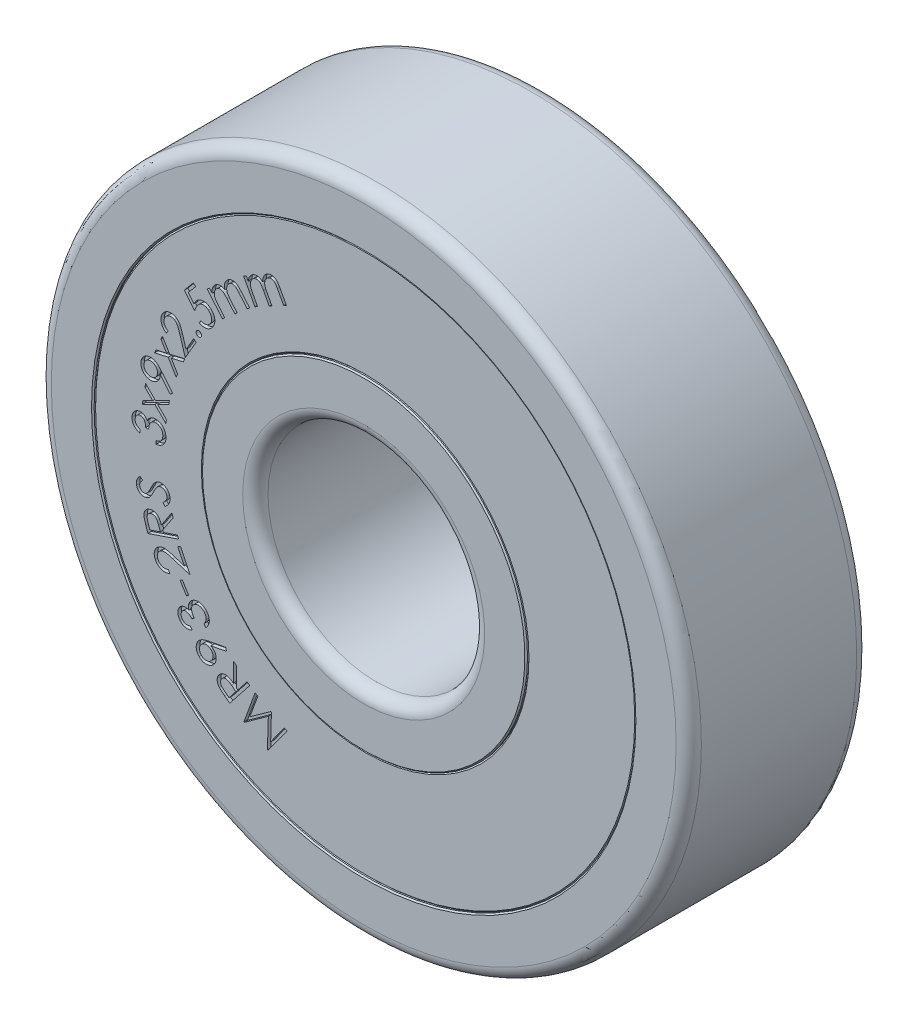
from build123d import *

# Parameters (mm, degrees)
SKETCH_R_INNER_BODY_W          = 2.5
SKETCH_R_INNER_BODY_H          = 0.75
FILLET_INNER_BODY_R            = 0.175
CHAMFER_INNER_BODY_SIZE        = 0.018
SKETCH_R_OUTER_BODY_W          = 2.5
SKETCH_R_OUTER_BODY_H          = 0.75
FILLET_OUTER_BODY_R            = 0.175
CHAMFER_OUTER_BODY_SIZE        = 0.018
SKETCH_R_SEAL_FACES_W          = 2.46
SKETCH_R_SEAL_FACES_H          = 1.5
CHAMFER_SEALS_SIZE             = 0.018
CUT_EXTRUDE_SEAL_LABEL_1_DEPTH = 0.05
CUT_EXTRUDE_SEAL_LABEL_2_DEPTH = 0.05


with BuildPart() as part:
    # Sketch R, INNER BODY → Revolve INNER BODY (revolve)
    with BuildSketch(Plane(origin=(0, 0, 0), x_dir=(0, 0, -1), z_dir=(1, 0, 0))):
        with Locations((0, 1.875)):
            Rectangle(SKETCH_R_INNER_BODY_W, SKETCH_R_INNER_BODY_H)
    revolve(axis=Axis((0, 0, 17.5), (0, 0, -1)))

    # Fillet INNER BODY
    fillet_inner_body_edges = [part.edges().sort_by_distance(p)[0] for p in [
        (0, -1.5, 1.25),
        (0, -1.5, -1.25),
    ]]
    fillet(fillet_inner_body_edges, radius=FILLET_INNER_BODY_R)

    # Chamfer INNER BODY
    chamfer_inner_body_edges = [part.edges().sort_by_distance(p)[0] for p in [
        (0, -2.25, -1.25),
        (0, -2.25, 1.25),
    ]]
    chamfer(chamfer_inner_body_edges, length=CHAMFER_INNER_BODY_SIZE)


with BuildPart() as body_2:
    # Sketch R, OUTER BODY → Revolve OUTER BODY (revolve)
    with BuildSketch(Plane(origin=(0, 0, 0), x_dir=(0, 0, -1), z_dir=(1, 0, 0))):
        with Locations((0, 4.125)):
            Rectangle(SKETCH_R_OUTER_BODY_W, SKETCH_R_OUTER_BODY_H)
    revolve(axis=Axis((0, 0, 17.5), (0, 0, -1)))

    # Fillet OUTER BODY
    fillet_outer_body_edges = [body_2.edges().sort_by_distance(p)[0] for p in [
        (0, -4.5, -1.25),
        (0, -4.5, 1.25),
    ]]
    fillet(fillet_outer_body_edges, radius=FILLET_OUTER_BODY_R)

    # Chamfer OUTER BODY
    chamfer_outer_body_edges = [body_2.edges().sort_by_distance(p)[0] for p in [
        (0, -3.75, 1.25),
        (0, -3.75, -1.25),
    ]]
    chamfer(chamfer_outer_body_edges, length=CHAMFER_OUTER_BODY_SIZE)


with BuildPart() as body_3:
    # Sketch R, SEAL FACES → Revolve SEALS (revolve)
    with BuildSketch(Plane(origin=(0, 0, 0), x_dir=(0, 0, -1), z_dir=(1, 0, 0))):
        with Locations((0, 3)):
            Rectangle(SKETCH_R_SEAL_FACES_W, SKETCH_R_SEAL_FACES_H)
    revolve(axis=Axis((0, 0, 17.5), (0, 0, -1)))

    # Chamfer SEALS
    chamfer_seals_edges = [body_3.edges().sort_by_distance(p)[0] for p in [
        (0, -2.25, -1.23),
        (0, -3.75, -1.23),
        (0, -3.75, 1.23),
        (0, -2.25, 1.23),
    ]]
    chamfer(chamfer_seals_edges, length=CHAMFER_SEALS_SIZE)

    # Sketch TEXT RADIUS 1 — MANUALLY ASSIGN TEXT AND FONT SIZE (FROM EQUATIONS) → Cut-Extrude SEAL LABEL 1 (cut)
    # profile 1 of 17: a face of its own
    with BuildSketch(Plane.XY.offset(1.23)):
        with BuildLine():
            Line((-1.68351575, 2.603495697), (-1.646286183, 2.62359786))
            Line((-1.646286183, 2.62359786), (-1.619062625, 2.573297379))
            add(Edge.make_bspline(
                [(-1.619062625, 2.573297379), (-1.618240809, 2.579416979), (-1.616665761, 2.591145458), (-1.61266087, 2.607705282), (-1.60766621, 2.62255044), (-1.603120946, 2.63142569), (-1.600943635, 2.635677187)],
                knots=[0, 0, 0, 0, 1.132946328, 2.171341033, 3.124020469, 4, 4, 4, 4], degree=3))
            add(Edge.make_bspline(
                [(-1.600943635, 2.635677187), (-1.597661362, 2.64086141), (-1.591186056, 2.651088908), (-1.579100963, 2.664421905), (-1.56569787, 2.676059703), (-1.555611689, 2.682064531), (-1.55055301, 2.685076225)],
                knots=[0, 0, 0, 0, 1.029422854, 2.03085757, 3.012385559, 4, 4, 4, 4], degree=3))
            add(Edge.make_bspline(
                [(-1.55055301, 2.685076225), (-1.547010792, 2.686862907), (-1.539986892, 2.690405735), (-1.528895043, 2.694398443), (-1.517508347, 2.697050319), (-1.505985961, 2.698694715), (-1.49456227, 2.699186016), (-1.483505345, 2.698341413), (-1.472944331, 2.696471519), (-1.462712766, 2.693367047), (-1.45255704, 2.688690091), (-1.442221169, 2.682385216), (-1.431392217, 2.674490215), (-1.424416617, 2.668255453), (-1.420745318, 2.664974062)],
                knots=[0, 0, 0, 0, 1.007893942, 1.99856265, 2.987934747, 3.975299643, 4.953789903, 5.888235043, 6.788718997, 7.675491184, 8.598470306, 9.622901381, 10.748919328, 12, 12, 12, 12], degree=3))
            add(Edge.make_bspline(
                [(-1.420745318, 2.664974062), (-1.420662703, 2.668611429), (-1.420499958, 2.675776814), (-1.419612139, 2.686348751), (-1.418047191, 2.696574121), (-1.416009843, 2.706455667), (-1.413376687, 2.715966741), (-1.41022094, 2.725134278), (-1.406453124, 2.733932131), (-1.400675786, 2.745069214), (-1.39237171, 2.758063957), (-1.380338941, 2.771738773), (-1.36670837, 2.783669274), (-1.356369537, 2.789797339), (-1.351153972, 2.792888725)],
                knots=[0, 0, 0, 0, 0.855519476, 1.685320073, 2.492825945, 3.286956377, 4.056723802, 4.812084644, 5.565525887, 6.305086716, 7.76143023, 9.178709332, 10.576761301, 12, 12, 12, 12], degree=3))
            add(Edge.make_bspline(
                [(-1.351153972, 2.792888725), (-1.346168158, 2.795353271), (-1.336394017, 2.800184743), (-1.320868529, 2.80476061), (-1.305235567, 2.807102762), (-1.289540432, 2.806885294), (-1.274139611, 2.804363648), (-1.259215291, 2.799582312), (-1.245141586, 2.792172126), (-1.233965348, 2.784291535), (-1.225325183, 2.776569222), (-1.218661572, 2.769682491), (-1.21185962, 2.761767323), (-1.204967885, 2.752800576), (-1.198050354, 2.742723888), (-1.190915763, 2.731699199), (-1.183587783, 2.719660108), (-1.178942031, 2.711118651), (-1.176544597, 2.706710841)],
                knots=[0, 0, 0, 0, 1.202692996, 2.35774762, 3.488867218, 4.614807807, 5.742477376, 6.857930864, 7.993087118, 9.174031987, 9.810143083, 10.500470647, 11.248000588, 12.069362592, 12.94853042, 13.894416233, 14.913415839, 16, 16, 16, 16], degree=3))
            Line((-1.176544597, 2.706710841), (-1.090637145, 2.547786562))
            Line((-1.090637145, 2.547786562), (-1.128858299, 2.527053389))
            Line((-1.128858299, 2.527053389), (-1.21476575, 2.685977668))
            add(Edge.make_bspline(
                [(-1.21476575, 2.685977668), (-1.216820778, 2.689713994), (-1.220770921, 2.696895904), (-1.226741118, 2.707055504), (-1.232288883, 2.71626637), (-1.237579398, 2.724429258), (-1.242740572, 2.731442891), (-1.247515804, 2.737488506), (-1.251875539, 2.742638002), (-1.257514065, 2.747864593), (-1.26468884, 2.753117135), (-1.273899008, 2.758059567), (-1.283974931, 2.76115051), (-1.294591101, 2.76288429), (-1.305603298, 2.762978758), (-1.316783039, 2.76129574), (-1.328053028, 2.757881895), (-1.335216074, 2.754269143), (-1.338894356, 2.752413966)],
                knots=[0, 0, 0, 0, 1.262703955, 2.427150203, 3.489288599, 4.446873273, 5.306509657, 6.066671534, 6.728798716, 7.30168236, 8.339272186, 9.354217877, 10.381377087, 11.444893699, 12.530515548, 13.627853015, 14.781883155, 16, 16, 16, 16], degree=3))
            add(Edge.make_bspline(
                [(-1.338894356, 2.752413966), (-1.343256421, 2.749815419), (-1.351905609, 2.744662971), (-1.363174703, 2.734548915), (-1.372751466, 2.722757299), (-1.38049954, 2.709479215), (-1.386411342, 2.695147082), (-1.39003501, 2.680060384), (-1.391359526, 2.664453172), (-1.390661925, 2.651030037), (-1.388601184, 2.639718833), (-1.386109879, 2.630216488), (-1.382736988, 2.619758048), (-1.378509986, 2.608311096), (-1.373233618, 2.595982134), (-1.367063295, 2.582714476), (-1.3600689, 2.568461032), (-1.354852714, 2.558767132), (-1.352145558, 2.553736081)],
                knots=[0, 0, 0, 0, 1.078086967, 2.137651911, 3.200874055, 4.29826911, 5.396278353, 6.487755879, 7.585020608, 8.718245508, 9.335151436, 10.028168088, 10.806470145, 11.672089206, 12.623068298, 13.658388782, 14.784723943, 16, 16, 16, 16], degree=3))
            Line((-1.352145558, 2.553736081), (-1.290486904, 2.439703629))
            Line((-1.290486904, 2.439703629), (-1.327716472, 2.419511322))
            Line((-1.327716472, 2.419511322), (-1.408305414, 2.568609879))
            add(Edge.make_bspline(
                [(-1.408305414, 2.568609879), (-1.410598345, 2.572828182), (-1.414981021, 2.580890985), (-1.421602995, 2.5922897), (-1.42781399, 2.602524412), (-1.433511987, 2.611690428), (-1.439060109, 2.619550826), (-1.444167846, 2.626286779), (-1.448818356, 2.631983024), (-1.454669433, 2.637789551), (-1.462021301, 2.643728266), (-1.471662803, 2.648998905), (-1.481958673, 2.652761067), (-1.492856277, 2.654793248), (-1.50411911, 2.655209521), (-1.51546147, 2.65360067), (-1.526837695, 2.650238038), (-1.534042414, 2.646695929), (-1.537752529, 2.644871899)],
                knots=[0, 0, 0, 0, 1.336305489, 2.554195278, 3.66867879, 4.668704831, 5.557365218, 6.345224332, 7.021997584, 7.601559619, 8.637353205, 9.640591628, 10.645954342, 11.676059688, 12.713675014, 13.768738341, 14.85099789, 16, 16, 16, 16], degree=3))
            add(Edge.make_bspline(
                [(-1.537752529, 2.644871899), (-1.541929775, 2.64235605), (-1.55021662, 2.637365095), (-1.561086876, 2.627563225), (-1.570424, 2.616074256), (-1.578227941, 2.603064994), (-1.584131923, 2.588910485), (-1.587999037, 2.573980391), (-1.589612447, 2.55848815), (-1.589043308, 2.545141773), (-1.58743003, 2.53397674), (-1.585150771, 2.524858827), (-1.582297948, 2.51503317), (-1.578548579, 2.504506551), (-1.573927318, 2.49332377), (-1.56861404, 2.481356578), (-1.562371605, 2.468798003), (-1.557844066, 2.460246296), (-1.555510943, 2.455839447)],
                knots=[0, 0, 0, 0, 1.089941684, 2.162232425, 3.25725062, 4.39503195, 5.547166843, 6.679743556, 7.836682095, 9.021842795, 9.661302689, 10.359808926, 11.124173149, 11.952003323, 12.860382206, 13.833233437, 14.883425913, 16, 16, 16, 16], degree=3))
            Line((-1.555510943, 2.455839447), (-1.488804212, 2.332431995))
            Line((-1.488804212, 2.332431995), (-1.526033779, 2.312329831))
            Line((-1.526033779, 2.312329831), (-1.68351575, 2.603495697))
        make_face()
    # profile 2 of 17: a face of its own
    with BuildSketch(Plane.XY.offset(1.23)):
        with BuildLine():
            Line((-2.187806372, 2.194527604), (-2.155715026, 2.221751162))
            Line((-2.155715026, 2.221751162), (-2.118846036, 2.178301642))
            add(Edge.make_bspline(
                [(-2.118846036, 2.178301642), (-2.11927951, 2.184428376), (-2.120112022, 2.19619512), (-2.119671412, 2.213151453), (-2.117836809, 2.228660239), (-2.115230748, 2.238240526), (-2.113978247, 2.242844912)],
                knots=[0, 0, 0, 0, 1.131209843, 2.1725532, 3.121710119, 4, 4, 4, 4], degree=3))
            add(Edge.make_bspline(
                [(-2.113978247, 2.242844912), (-2.11181346, 2.24856155), (-2.107553803, 2.259810193), (-2.098648489, 2.275367743), (-2.087942355, 2.289436427), (-2.079336941, 2.29737887), (-2.075035939, 2.301348517)],
                knots=[0, 0, 0, 0, 1.030158995, 2.027046126, 3.013914036, 4, 4, 4, 4], degree=3))
            add(Edge.make_bspline(
                [(-2.075035939, 2.301348517), (-2.071963186, 2.303825082), (-2.065841959, 2.308758641), (-2.055810062, 2.314810327), (-2.045322622, 2.319877283), (-2.03438083, 2.323667938), (-2.023348469, 2.326471443), (-2.012407558, 2.328060895), (-2.001732856, 2.328304783), (-1.991093316, 2.327448775), (-1.980239998, 2.324971887), (-1.968825147, 2.321037955), (-1.956708308, 2.315456148), (-1.948590597, 2.310875747), (-1.944326805, 2.308469912)],
                knots=[0, 0, 0, 0, 1.006217996, 2.004485053, 2.982065791, 3.974068501, 4.954262655, 5.883704173, 6.78891194, 7.674148948, 8.600770466, 9.621754793, 10.750836944, 12, 12, 12, 12], degree=3))
            add(Edge.make_bspline(
                [(-1.944326805, 2.308469912), (-1.94498759, 2.312040297), (-1.946287982, 2.319066637), (-1.947696831, 2.329529654), (-1.948263227, 2.339770708), (-1.948444096, 2.349796886), (-1.947733589, 2.35960486), (-1.946651112, 2.369201921), (-1.944671825, 2.378513001), (-1.941520888, 2.390568193), (-1.935928489, 2.404857286), (-1.927137063, 2.420727308), (-1.916177069, 2.435071033), (-1.907373462, 2.443205392), (-1.902950603, 2.447292027)],
                knots=[0, 0, 0, 0, 0.857978525, 1.688458505, 2.492318432, 3.280472004, 4.055987478, 4.814247031, 5.560612236, 6.302913716, 7.757275519, 9.171711964, 10.579091592, 12, 12, 12, 12], degree=3))
            add(Edge.make_bspline(
                [(-1.902950603, 2.447292027), (-1.898596479, 2.450733138), (-1.890047556, 2.457489444), (-1.875840115, 2.4651443), (-1.861065526, 2.470601097), (-1.845750801, 2.473516193), (-1.83022699, 2.474311546), (-1.814746932, 2.47254601), (-1.799472327, 2.468401123), (-1.787004661, 2.462983239), (-1.776997242, 2.457244972), (-1.76907448, 2.451914494), (-1.760867087, 2.445543268), (-1.75231223, 2.438247015), (-1.743448002, 2.429904261), (-1.734324761, 2.420510109), (-1.724723544, 2.410265073), (-1.718427761, 2.402935741), (-1.71518017, 2.399155008)],
                knots=[0, 0, 0, 0, 1.205362471, 2.366618654, 3.493591867, 4.619142432, 5.744655036, 6.862797764, 7.993348108, 9.176095501, 9.808493644, 10.501035197, 11.251493975, 12.067550041, 12.94618343, 13.898377235, 14.915907397, 16, 16, 16, 16], degree=3))
            Line((-1.71518017, 2.399155008), (-1.598803968, 2.261955489))
            Line((-1.598803968, 2.261955489), (-1.631796757, 2.233920633))
            Line((-1.631796757, 2.233920633), (-1.748172959, 2.371120152))
            add(Edge.make_bspline(
                [(-1.748172959, 2.371120152), (-1.750957619, 2.374343883), (-1.756301686, 2.380530574), (-1.76412177, 2.389267634), (-1.771414479, 2.397063546), (-1.778281673, 2.403848538), (-1.784674669, 2.40969079), (-1.790502816, 2.41470695), (-1.795891657, 2.418696468), (-1.80238658, 2.422667625), (-1.810413817, 2.426371072), (-1.820442329, 2.429059827), (-1.830868314, 2.430297592), (-1.841572142, 2.429683403), (-1.852347169, 2.427548911), (-1.862931211, 2.423595058), (-1.873182503, 2.417874764), (-1.879455597, 2.412946752), (-1.882668151, 2.410423037)],
                knots=[0, 0, 0, 0, 1.267390438, 2.432259926, 3.488420727, 4.442985664, 5.303543678, 6.06475109, 6.72992016, 7.295684102, 8.327810271, 9.347118854, 10.37287573, 11.438078523, 12.523350395, 13.62933905, 14.785945972, 16, 16, 16, 16], degree=3))
            add(Edge.make_bspline(
                [(-1.882668151, 2.410423037), (-1.886390392, 2.406956437), (-1.893733602, 2.400117556), (-1.90270269, 2.387956096), (-1.909556133, 2.374505274), (-1.91442112, 2.359982477), (-1.917103871, 2.344823438), (-1.917575567, 2.329391478), (-1.915710937, 2.313911224), (-1.912305285, 2.300939687), (-1.907916043, 2.290330774), (-1.903715461, 2.281486696), (-1.89822843, 2.272007265), (-1.891583012, 2.261861229), (-1.884031235, 2.250852132), (-1.875380856, 2.239126289), (-1.865485199, 2.226787167), (-1.858464172, 2.218373468), (-1.854813584, 2.213998758)],
                knots=[0, 0, 0, 0, 1.084578944, 2.139649296, 3.207369614, 4.297176387, 5.398711147, 6.483764663, 7.582285438, 8.718712892, 9.334838498, 10.032355127, 10.808463559, 11.67181925, 12.622408231, 13.659525329, 14.783068342, 16, 16, 16, 16], degree=3))
            Line((-1.854813584, 2.213998758), (-1.771340026, 2.115561258))
            Line((-1.771340026, 2.115561258), (-1.803431372, 2.0883377))
            Line((-1.803431372, 2.0883377), (-1.912505891, 2.216973517))
            add(Edge.make_bspline(
                [(-1.912505891, 2.216973517), (-1.915623499, 2.220585634), (-1.921605753, 2.227516783), (-1.930316555, 2.237372647), (-1.93851402, 2.246099861), (-1.946077804, 2.25377569), (-1.953010797, 2.260408027), (-1.95939223, 2.265912021), (-1.965174707, 2.270363195), (-1.971955312, 2.274941739), (-1.980348398, 2.279151768), (-1.990808934, 2.282322453), (-2.001606721, 2.28392392), (-2.01264017, 2.28354679), (-2.023695716, 2.281762211), (-2.034397098, 2.277845568), (-2.044787364, 2.27229544), (-2.051066271, 2.267375904), (-2.054302766, 2.264840104)],
                knots=[0, 0, 0, 0, 1.334011259, 2.559781936, 3.677121852, 4.681045552, 5.572403249, 6.35876616, 7.035905164, 7.611406948, 8.644570529, 9.646383074, 10.656229472, 11.681438665, 12.721410646, 13.773627339, 14.852404455, 16, 16, 16, 16], degree=3))
            add(Edge.make_bspline(
                [(-2.054302766, 2.264840104), (-2.057833297, 2.261513511), (-2.064854539, 2.254897844), (-2.073561439, 2.243154133), (-2.080171695, 2.229925936), (-2.085143842, 2.215667784), (-2.088023469, 2.20066724), (-2.088666855, 2.185324996), (-2.086995943, 2.169906047), (-2.083762243, 2.157025432), (-2.079796494, 2.14654319), (-2.075923213, 2.138057992), (-2.070979698, 2.129140083), (-2.065196148, 2.119673125), (-2.058510322, 2.109644451), (-2.050840016, 2.099144865), (-2.042255279, 2.088100551), (-2.036058529, 2.0807152), (-2.032848439, 2.076889383)],
                knots=[0, 0, 0, 0, 1.089292012, 2.166298343, 3.266204418, 4.402951166, 5.551821586, 6.687905515, 7.842938267, 9.027724414, 9.66273152, 10.361143584, 11.123076622, 11.953911513, 12.855270659, 13.832379677, 14.877112346, 16, 16, 16, 16], degree=3))
            Line((-2.032848439, 2.076889383), (-1.94252392, 1.970429046))
            Line((-1.94252392, 1.970429046), (-1.974615266, 1.943205489))
            Line((-1.974615266, 1.943205489), (-2.187806372, 2.194527604))
        make_face()
    # profile 3 of 17: a face of its own
    with BuildSketch(Plane.XY.offset(1.23)):
        with BuildLine():
            Line((-2.379080766, 2.171835255), (-2.34635841, 2.144431409))
            Line((-2.34635841, 2.144431409), (-2.449212978, 2.021925399))
            Line((-2.449212978, 2.021925399), (-2.36979591, 1.926102082))
            add(Edge.make_bspline(
                [(-2.36979591, 1.926102082), (-2.367746679, 1.930575884), (-2.363770479, 1.939256569), (-2.357115959, 1.951410997), (-2.350097121, 1.962349521), (-2.344908674, 1.968898914), (-2.342392064, 1.972075639)],
                knots=[0, 0, 0, 0, 1.099524704, 2.13344848, 3.094645842, 4, 4, 4, 4], degree=3))
            add(Edge.make_bspline(
                [(-2.342392064, 1.972075639), (-2.339060768, 1.975832511), (-2.332539073, 1.983187357), (-2.321821186, 1.993011736), (-2.310489364, 2.001408029), (-2.298698889, 2.008595494), (-2.286278299, 2.014298826), (-2.27337485, 2.018782241), (-2.259837553, 2.021688967), (-2.245930375, 2.023447975), (-2.231856259, 2.023668761), (-2.217894828, 2.022642113), (-2.204200269, 2.020041162), (-2.190688303, 2.016215218), (-2.177510173, 2.010707008), (-2.164547848, 2.003927087), (-2.151872672, 1.995672503), (-2.143844659, 1.989299992), (-2.139747834, 1.986047995)],
                knots=[0, 0, 0, 0, 1.057951054, 2.071155792, 3.05800254, 4.026961825, 4.976324716, 5.933788031, 6.900425856, 7.889546635, 8.884168414, 9.862563495, 10.835303957, 11.817586851, 12.817398522, 13.840180039, 14.897808706, 16, 16, 16, 16], degree=3))
            add(Edge.make_bspline(
                [(-2.139747834, 1.986047995), (-2.136982563, 1.983647577), (-2.131520884, 1.978906518), (-2.123928337, 1.971265253), (-2.116866631, 1.963357369), (-2.110467591, 1.955011667), (-2.10457454, 1.946373596), (-2.099356381, 1.937308847), (-2.094660664, 1.927960171), (-2.08929737, 1.915187033), (-2.084228566, 1.898917004), (-2.080626266, 1.879076915), (-2.080274365, 1.859150851), (-2.082142421, 1.842648471), (-2.084998023, 1.829614184), (-2.08790551, 1.819916609), (-2.091528792, 1.81038647), (-2.095749878, 1.800964587), (-2.100769405, 1.791764177), (-2.106363495, 1.782626529), (-2.112648185, 1.773594146), (-2.117353067, 1.767838895), (-2.119735814, 1.764924197)],
                knots=[0, 0, 0, 0, 0.88285087, 1.7437166, 2.595875965, 3.438023981, 4.278174163, 5.115914388, 5.958529961, 6.799710869, 8.454565936, 10.05817063, 11.645614618, 13.242952196, 14.05176472, 14.861096505, 15.682120765, 16.509167405, 17.348942464, 18.207762183, 19.092336386, 20, 20, 20, 20], degree=3))
            add(Edge.make_bspline(
                [(-2.119735814, 1.764924197), (-2.122684523, 1.761565625), (-2.128482115, 1.75496218), (-2.138010641, 1.746117368), (-2.147948298, 1.738316557), (-2.158353604, 1.731600128), (-2.169243414, 1.72601433), (-2.180544682, 1.721328496), (-2.192383713, 1.717955776), (-2.204541407, 1.715618915), (-2.216849026, 1.714334153), (-2.229131296, 1.714265102), (-2.241288952, 1.715255182), (-2.253295383, 1.71733754), (-2.265195965, 1.720498343), (-2.276905239, 1.724873996), (-2.288550527, 1.730269696), (-2.295975376, 1.73471652), (-2.299753843, 1.736979485)],
                knots=[0, 0, 0, 0, 1.072496443, 2.108685047, 3.116016703, 4.10259632, 5.077046759, 6.05101637, 7.035060468, 8.026901601, 9.020420533, 10.001604339, 10.971584614, 11.945340448, 12.923575796, 13.923335371, 14.943196254, 16, 16, 16, 16], degree=3))
            Line((-2.299753843, 1.736979485), (-2.270096391, 1.772316024))
            add(Edge.make_bspline(
                [(-2.270096391, 1.772316024), (-2.266314074, 1.770381695), (-2.259042275, 1.766662797), (-2.247948892, 1.762415304), (-2.237184427, 1.759821992), (-2.226718435, 1.758448936), (-2.216369581, 1.758660161), (-2.206045174, 1.760274379), (-2.195612432, 1.762941102), (-2.185303159, 1.767046942), (-2.175340366, 1.772170671), (-2.166014141, 1.778380449), (-2.157501735, 1.785578311), (-2.15251918, 1.791097088), (-2.150024276, 1.793860495)],
                knots=[0, 0, 0, 0, 1.149293788, 2.209606258, 3.205662792, 4.139701188, 5.058786582, 5.996111554, 6.962615511, 7.966871268, 8.992563814, 9.989483109, 10.99327779, 12, 12, 12, 12], degree=3))
            add(Edge.make_bspline(
                [(-2.150024276, 1.793860495), (-2.14777629, 1.796704886), (-2.143335158, 1.802324277), (-2.13768231, 1.811376501), (-2.133307426, 1.82089777), (-2.129829138, 1.830725634), (-2.12735011, 1.840926883), (-2.126157121, 1.851549421), (-2.125863592, 1.862502206), (-2.126685141, 1.873703166), (-2.128576585, 1.884893763), (-2.131428577, 1.895804249), (-2.135375329, 1.906303026), (-2.140285594, 1.916401289), (-2.146435563, 1.925994707), (-2.153467962, 1.9352379), (-2.161604861, 1.944009533), (-2.167674252, 1.949350471), (-2.170757449, 1.95206362)],
                knots=[0, 0, 0, 0, 0.978912495, 1.933944233, 2.874447548, 3.803746025, 4.7467678, 5.70321269, 6.685652204, 7.702883716, 8.731707251, 9.747610172, 10.744165154, 11.756950405, 12.774797019, 13.817044847, 14.891077983, 16, 16, 16, 16], degree=3))
            add(Edge.make_bspline(
                [(-2.170757449, 1.95206362), (-2.17363118, 1.954372884), (-2.17928755, 1.958918211), (-2.188306084, 1.964651666), (-2.197475803, 1.969398826), (-2.206805498, 1.973111456), (-2.216306901, 1.975868244), (-2.226019666, 1.977461217), (-2.235896355, 1.978128779), (-2.245864608, 1.977638885), (-2.25574416, 1.976225304), (-2.265424137, 1.973771563), (-2.274779319, 1.970235842), (-2.283876559, 1.965727331), (-2.292554291, 1.960019039), (-2.301066768, 1.953467679), (-2.309194631, 1.945745344), (-2.314220837, 1.940024939), (-2.316791103, 1.937099678)],
                knots=[0, 0, 0, 0, 1.069743425, 2.105577751, 3.096686608, 4.063891077, 5.01662482, 5.96326716, 6.916200617, 7.885606139, 8.855404181, 9.809734462, 10.778786581, 11.754219391, 12.751262512, 13.78962895, 14.8696758, 16, 16, 16, 16], degree=3))
            add(Edge.make_bspline(
                [(-2.316791103, 1.937099678), (-2.318900075, 1.934452072), (-2.323247734, 1.928994018), (-2.329260449, 1.92003903), (-2.335015278, 1.910167351), (-2.340586551, 1.899460747), (-2.345938731, 1.887860239), (-2.350931066, 1.87535376), (-2.355726081, 1.861967898), (-2.358649082, 1.852704941), (-2.360150478, 1.847947034)],
                knots=[0, 0, 0, 0, 0.814004859, 1.678075476, 2.591727332, 3.561633421, 4.580406376, 5.663607227, 6.799914686, 8, 8, 8, 8], degree=3))
            Line((-2.360150478, 1.847947034), (-2.50402067, 2.022916985))
            Line((-2.50402067, 2.022916985), (-2.379080766, 2.171835255))
        make_face()
    # profile 4 of 17: a face of its own
    with BuildSketch(Plane.XY.offset(1.23)):
        with BuildLine():
            add(Edge.make_bspline(
                [(-2.333596291, 1.620589432), (-2.332110788, 1.622581608), (-2.329179079, 1.626513261), (-2.323494528, 1.631148639), (-2.316993999, 1.634455063), (-2.309899918, 1.636502344), (-2.302524199, 1.637244702), (-2.295208775, 1.636494082), (-2.288097022, 1.63435218), (-2.283848297, 1.631748219), (-2.281673214, 1.630415153)],
                knots=[0, 0, 0, 0, 1.012148339, 1.997522502, 2.963674408, 3.973587598, 4.997059266, 5.971672391, 6.96162262, 8, 8, 8, 8], degree=3))
            add(Edge.make_bspline(
                [(-2.281673214, 1.630415153), (-2.279688302, 1.628892087), (-2.275804119, 1.62591167), (-2.271067603, 1.620272592), (-2.267723373, 1.613723488), (-2.265587535, 1.606574011), (-2.264759112, 1.599174829), (-2.26536783, 1.591865595), (-2.267572387, 1.584846816), (-2.27010364, 1.580640793), (-2.271396772, 1.578492076)],
                knots=[0, 0, 0, 0, 1.019698909, 1.995401278, 2.977870894, 4.002798874, 5.027285993, 6.000515877, 6.978530522, 8, 8, 8, 8], degree=3))
            add(Edge.make_bspline(
                [(-2.271396772, 1.578492076), (-2.272909842, 1.576494135), (-2.275873215, 1.572581132), (-2.281658925, 1.568028442), (-2.288139822, 1.564574447), (-2.295356109, 1.562724825), (-2.30274147, 1.561884548), (-2.310024507, 1.562787002), (-2.317056866, 1.564915983), (-2.321261822, 1.567457913), (-2.323409993, 1.568756499)],
                knots=[0, 0, 0, 0, 1.020191444, 1.99806212, 2.981006288, 3.99964521, 5.023376435, 5.999550087, 6.978037133, 8, 8, 8, 8], degree=3))
            add(Edge.make_bspline(
                [(-2.323409993, 1.568756499), (-2.32542706, 1.570276202), (-2.329390264, 1.573262168), (-2.334178631, 1.578952437), (-2.337513294, 1.585514899), (-2.339706729, 1.592588543), (-2.340403287, 1.599975293), (-2.339743632, 1.607264154), (-2.337379544, 1.614240314), (-2.334878862, 1.618436999), (-2.333596291, 1.620589432)],
                knots=[0, 0, 0, 0, 1.028274883, 2.020390717, 3.001996392, 4.0142858, 5.024419738, 6.01015143, 6.979428758, 8, 8, 8, 8], degree=3))
        make_face()
    # profile 5 of 17: a face of its own
    with BuildSketch(Plane.XY.offset(1.23)):
        with BuildLine():
            Line((-2.72871434, 1.419894902), (-2.750258811, 1.382935767))
            add(Edge.make_bspline(
                [(-2.750258811, 1.382935767), (-2.754784033, 1.385901301), (-2.763655455, 1.391715049), (-2.775922898, 1.401468796), (-2.78672963, 1.412113637), (-2.796515846, 1.423271069), (-2.804775389, 1.43534054), (-2.811908428, 1.448044031), (-2.817647784, 1.461510041), (-2.822141592, 1.475542783), (-2.825315503, 1.489872871), (-2.826927411, 1.504255544), (-2.827128762, 1.518480237), (-2.825852388, 1.532556639), (-2.823127691, 1.546510182), (-2.818944265, 1.560329558), (-2.813366359, 1.574074185), (-2.808524728, 1.582831301), (-2.80605809, 1.587292738)],
                knots=[0, 0, 0, 0, 1.100068157, 2.15661651, 3.180856726, 4.181786367, 5.170099216, 6.149510302, 7.140540272, 8.141675114, 9.142604755, 10.120508423, 11.08006055, 12.031168299, 12.990000093, 13.966374889, 14.963940679, 16, 16, 16, 16], degree=3))
            add(Edge.make_bspline(
                [(-2.80605809, 1.587292738), (-2.80343952, 1.591588203), (-2.798322144, 1.599982672), (-2.789343873, 1.611348532), (-2.779938463, 1.621644486), (-2.769631173, 1.630520914), (-2.758698911, 1.638238477), (-2.747018831, 1.644700562), (-2.734575878, 1.649709169), (-2.721659018, 1.653579592), (-2.708491765, 1.656156752), (-2.695365383, 1.657550786), (-2.682449982, 1.657603832), (-2.669749422, 1.656604893), (-2.657307357, 1.654054791), (-2.645011647, 1.65051233), (-2.632981346, 1.64551687), (-2.625313429, 1.641329551), (-2.621442706, 1.639215815)],
                knots=[0, 0, 0, 0, 1.126769813, 2.202004582, 3.241056662, 4.248604555, 5.244670884, 6.236537464, 7.233491685, 8.245801937, 9.255082153, 10.237017864, 11.200292763, 12.146793941, 13.08738018, 14.042281291, 15.011753968, 16, 16, 16, 16], degree=3))
            add(Edge.make_bspline(
                [(-2.621442706, 1.639215815), (-2.616175043, 1.635897113), (-2.605710142, 1.629304076), (-2.591813276, 1.617015624), (-2.579394506, 1.603261943), (-2.57058245, 1.590203308), (-2.564034029, 1.578610527), (-2.558984928, 1.56856086), (-2.553886495, 1.557205651), (-2.548670272, 1.54457446), (-2.543344652, 1.530659421), (-2.537972805, 1.515438084), (-2.532450252, 1.498916035), (-2.528900968, 1.487420502), (-2.527061696, 1.481463411)],
                knots=[0, 0, 0, 0, 1.186547126, 2.357230964, 3.526903023, 4.715125859, 5.354599845, 6.067584288, 6.860666433, 7.72970934, 8.675462827, 9.703910553, 10.810145274, 12, 12, 12, 12], degree=3))
            Line((-2.527061696, 1.481463411), (-2.479465542, 1.325243459))
            Line((-2.479465542, 1.325243459), (-2.375889821, 1.503188171))
            Line((-2.375889821, 1.503188171), (-2.338660254, 1.481553555))
            Line((-2.338660254, 1.481553555), (-2.491004004, 1.219774709))
            Line((-2.491004004, 1.219774709), (-2.564291263, 1.459648507))
            add(Edge.make_bspline(
                [(-2.564291263, 1.459648507), (-2.566080237, 1.465482186), (-2.569507406, 1.476657868), (-2.574662284, 1.492679393), (-2.579584072, 1.507267902), (-2.584372321, 1.520417269), (-2.588869585, 1.532184478), (-2.593135261, 1.542524243), (-2.59729835, 1.551423392), (-2.602501932, 1.561297236), (-2.609416578, 1.572155695), (-2.619220995, 1.583396184), (-2.630128055, 1.593326554), (-2.638395078, 1.598555501), (-2.642536456, 1.60117495)],
                knots=[0, 0, 0, 0, 1.324707951, 2.537766639, 3.653822211, 4.667069706, 5.575690649, 6.388621532, 7.094850754, 7.707679649, 8.811446589, 9.879890536, 10.937927963, 12, 12, 12, 12], degree=3))
            add(Edge.make_bspline(
                [(-2.642536456, 1.60117495), (-2.645239571, 1.602681318), (-2.650572407, 1.605653155), (-2.659042686, 1.608959061), (-2.667614835, 1.611403582), (-2.676340143, 1.612985534), (-2.685231409, 1.613489125), (-2.694288638, 1.613125562), (-2.703491959, 1.611844018), (-2.712735899, 1.609704752), (-2.721745636, 1.606647593), (-2.730378696, 1.602878582), (-2.738424386, 1.59824868), (-2.745941318, 1.592873672), (-2.753034453, 1.586867628), (-2.759434051, 1.579895843), (-2.765432662, 1.572289996), (-2.768825302, 1.566688443), (-2.770541263, 1.563855238)],
                knots=[0, 0, 0, 0, 1.00030143, 1.973442883, 2.933676341, 3.881574149, 4.836179744, 5.809224053, 6.810233995, 7.838495205, 8.874632418, 9.88452703, 10.881847211, 11.871937582, 12.871671841, 13.882876062, 14.929181516, 16, 16, 16, 16], degree=3))
            add(Edge.make_bspline(
                [(-2.770541263, 1.563855238), (-2.772221105, 1.560788702), (-2.775513165, 1.554779076), (-2.779402478, 1.54541657), (-2.78231838, 1.536002717), (-2.784224876, 1.526487543), (-2.785129315, 1.516911243), (-2.785037562, 1.5072741), (-2.783938267, 1.497612289), (-2.781885034, 1.487930443), (-2.778706033, 1.478437945), (-2.774621708, 1.469115742), (-2.769474457, 1.460120094), (-2.763278157, 1.451429057), (-2.756151577, 1.44302333), (-2.747926579, 1.434972328), (-2.738792123, 1.427138315), (-2.732117041, 1.422340595), (-2.72871434, 1.419894902)],
                knots=[0, 0, 0, 0, 1.005094855, 1.96972888, 2.910132439, 3.83556416, 4.755734715, 5.671878423, 6.602421176, 7.548289251, 8.513039415, 9.476550037, 10.471336721, 11.48806864, 12.542663771, 13.636577879, 14.795218366, 16, 16, 16, 16], degree=3))
        make_face()
    # profile 6 of 17: a face of its own
    with BuildSketch(Plane.XY.offset(1.23)):
        Polygon((-2.915236346, 1.065343744), (-2.895224327, 1.112218744), (-2.748559663, 1.144580523), (-2.826714711, 1.272855763), (-2.806702692, 1.319730763), (-2.706822884, 1.154496388), (-2.497688269, 1.203354561), (-2.517880577, 1.155938696), (-2.685007981, 1.117447109), (-2.59657649, 0.971593744), (-2.616408221, 0.924989176), (-2.726654615, 1.107891821), align=None)
    # profile 7 of 17: a face of its own
    with BuildSketch(Plane.XY.offset(1.23)):
        with BuildLine():
            Line((-2.665523748, 0.705584492), (-2.698696825, 0.677369348))
            Line((-2.698696825, 0.677369348), (-2.838871103, 0.844857329))
            add(Edge.make_bspline(
                [(-2.838871103, 0.844857329), (-2.838832382, 0.84073841), (-2.838756505, 0.832667206), (-2.839805311, 0.820888875), (-2.841527068, 0.809715995), (-2.843435434, 0.80262597), (-2.844369902, 0.799154204)],
                knots=[0, 0, 0, 0, 1.068983608, 2.094720344, 3.067043558, 4, 4, 4, 4], degree=3))
            add(Edge.make_bspline(
                [(-2.844369902, 0.799154204), (-2.845734673, 0.795038289), (-2.848433189, 0.786900032), (-2.853776969, 0.775356563), (-2.860121308, 0.764633569), (-2.867471352, 0.754763863), (-2.875775201, 0.745655126), (-2.885268224, 0.737589644), (-2.895554502, 0.730089957), (-2.906841466, 0.723711208), (-2.918677379, 0.718347292), (-2.930798671, 0.714001609), (-2.943215942, 0.711186759), (-2.955788653, 0.709394277), (-2.968575934, 0.709068529), (-2.981537368, 0.71003512), (-2.994758238, 0.712013534), (-3.003465493, 0.714444796), (-3.007891536, 0.715680646)],
                knots=[0, 0, 0, 0, 1.016489017, 2.009868779, 2.976869906, 3.934008949, 4.891718721, 5.861080018, 6.850827666, 7.87365001, 8.895597772, 9.896450406, 10.888028299, 11.876821876, 12.871001421, 13.88133868, 14.923049194, 16, 16, 16, 16], degree=3))
            add(Edge.make_bspline(
                [(-3.007891536, 0.715680646), (-3.01384403, 0.717689363), (-3.025508518, 0.721625639), (-3.041726362, 0.730105221), (-3.056459001, 0.740296637), (-3.069474683, 0.752444327), (-3.080659107, 0.766174791), (-3.089984268, 0.781308737), (-3.097208416, 0.797818419), (-3.102265089, 0.81543617), (-3.105306185, 0.833653212), (-3.10578563, 0.852041941), (-3.104112884, 0.870387724), (-3.100971795, 0.882240202), (-3.09938793, 0.888216704)],
                knots=[0, 0, 0, 0, 1.038185257, 2.034424329, 3.016480404, 3.994487942, 4.969812466, 5.938524544, 6.926991278, 7.941877382, 8.964443807, 9.974201723, 10.978509941, 12, 12, 12, 12], degree=3))
            add(Edge.make_bspline(
                [(-3.09938793, 0.888216704), (-3.097432109, 0.893956282), (-3.0935622, 0.905312971), (-3.085215383, 0.921173038), (-3.075060696, 0.935758675), (-3.06296543, 0.948807269), (-3.04929747, 0.960141936), (-3.034297901, 0.969570654), (-3.017993039, 0.976691256), (-3.000753115, 0.981719173), (-2.982963117, 0.984486312), (-2.965068886, 0.985053647), (-2.947250874, 0.98331638), (-2.935715511, 0.980318611), (-2.929916777, 0.978811656)],
                knots=[0, 0, 0, 0, 1.019281728, 2.01681462, 3.004530532, 4.003024445, 5.001505551, 5.985199643, 6.974700656, 7.986161161, 8.999705656, 9.996456235, 10.992834679, 12, 12, 12, 12], degree=3))
            add(Edge.make_bspline(
                [(-2.929916777, 0.978811656), (-2.925497261, 0.977333532), (-2.91654873, 0.974340663), (-2.903458327, 0.968168774), (-2.890508095, 0.960557515), (-2.879800132, 0.953131554), (-2.8711391, 0.946390996), (-2.864412556, 0.940601365), (-2.857415112, 0.934253956), (-2.850233163, 0.927272647), (-2.842945256, 0.919506469), (-2.835267276, 0.911306671), (-2.827529297, 0.902311355), (-2.822336713, 0.896095813), (-2.819670382, 0.892904204)],
                knots=[0, 0, 0, 0, 1.181831317, 2.392944078, 3.664188011, 4.990457205, 5.696712983, 6.448551315, 7.242080985, 8.094093301, 8.989433595, 9.944572695, 10.944561962, 12, 12, 12, 12], degree=3))
            Line((-2.819670382, 0.892904204), (-2.665523748, 0.705584492))
        make_face()
        with BuildLine():
            add(Edge.make_bspline(
                [(-2.878804998, 0.82015781), (-2.877966712, 0.823239239), (-2.876313686, 0.829315552), (-2.874849196, 0.83855905), (-2.874462923, 0.847707806), (-2.874712877, 0.856783994), (-2.876261167, 0.86570241), (-2.878489272, 0.874568812), (-2.881757404, 0.883287378), (-2.885912289, 0.891796759), (-2.890703713, 0.899952138), (-2.896200878, 0.90744318), (-2.902318075, 0.914193248), (-2.908989859, 0.920232977), (-2.916249534, 0.92561103), (-2.924127405, 0.930184233), (-2.932559685, 0.934137737), (-2.938516912, 0.936084966), (-2.941545382, 0.937074877)],
                knots=[0, 0, 0, 0, 1.038120547, 2.047084399, 3.035295889, 4.013307843, 4.993319474, 5.972209838, 6.983301062, 8.014776978, 9.04884199, 10.055436824, 11.030955653, 12.006474483, 12.977873041, 13.963374976, 14.964642867, 16, 16, 16, 16], degree=3))
            add(Edge.make_bspline(
                [(-2.941545382, 0.937074877), (-2.944594943, 0.93792581), (-2.950631355, 0.939610179), (-2.95983553, 0.940891256), (-2.968917903, 0.941379119), (-2.977919023, 0.940914789), (-2.986828366, 0.939566593), (-2.995661116, 0.937306811), (-3.004337168, 0.934014078), (-3.012821315, 0.929874796), (-3.020970436, 0.925114617), (-3.028421795, 0.919533243), (-3.035192877, 0.913414707), (-3.041257112, 0.906707711), (-3.04666387, 0.899435593), (-3.051209953, 0.89147822), (-3.055147298, 0.882982004), (-3.057108955, 0.877001183), (-3.058101873, 0.873973916)],
                knots=[0, 0, 0, 0, 1.029769519, 2.038363462, 3.017881286, 3.987628482, 4.967195158, 5.947152567, 6.95018004, 7.982780323, 9.017972524, 10.017798405, 11.008199014, 11.984781214, 12.957238651, 13.952266875, 14.96351427, 16, 16, 16, 16], degree=3))
            add(Edge.make_bspline(
                [(-3.058101873, 0.873973916), (-3.058955714, 0.870924504), (-3.06064584, 0.864888388), (-3.061885045, 0.855680413), (-3.062529316, 0.846574325), (-3.062024977, 0.837571377), (-3.060713718, 0.828643541), (-3.058261227, 0.81987077), (-3.055188701, 0.811090515), (-3.050977159, 0.802613762), (-3.046240316, 0.794452878), (-3.040643371, 0.787040316), (-3.03462631, 0.78020503), (-3.027907881, 0.774180344), (-3.020685257, 0.768774214), (-3.012751065, 0.764326649), (-3.004351043, 0.760348011), (-2.998391258, 0.758405127), (-2.995361488, 0.757417425)],
                knots=[0, 0, 0, 0, 1.031049845, 2.040897787, 3.02217137, 4.002907041, 4.974008147, 5.95767431, 6.967759745, 8.001643873, 9.038123142, 10.03919212, 11.024271562, 12.002067959, 12.975734466, 13.958620018, 14.962225594, 16, 16, 16, 16], degree=3))
            add(Edge.make_bspline(
                [(-2.995361488, 0.757417425), (-2.992312079, 0.756563589), (-2.986275966, 0.754873473), (-2.977067963, 0.753634194), (-2.967961979, 0.752990197), (-2.958958648, 0.753493521), (-2.950032232, 0.75480855), (-2.941281323, 0.757239123), (-2.932547669, 0.760354713), (-2.924085878, 0.764533457), (-2.915927017, 0.769313863), (-2.908436879, 0.774813888), (-2.901686578, 0.780930348), (-2.89564691, 0.787602327), (-2.890268841, 0.794861951), (-2.885695643, 0.802739836), (-2.881742138, 0.811172112), (-2.879794909, 0.817129339), (-2.878804998, 0.82015781)],
                knots=[0, 0, 0, 0, 1.031288199, 2.041369594, 3.022870025, 4.003832419, 4.975158021, 5.959051584, 6.960160239, 7.994283377, 9.031002256, 10.040180455, 11.018202896, 11.996225336, 12.970116932, 13.958148099, 14.961985684, 16, 16, 16, 16], degree=3))
        make_face(mode=Mode.SUBTRACT)
    # profile 8 of 17: a face of its own
    with BuildSketch(Plane.XY.offset(1.23)):
        Polygon((-3.085144889, 0.362483358), (-3.076941764, 0.413144416), (-2.941184553, 0.48012158), (-3.048456187, 0.586762205), (-3.040162918, 0.637423262), (-2.902692966, 0.499773022), (-2.709964601, 0.597940089), (-2.718348014, 0.546648022), (-2.872494649, 0.468853551), (-2.750890082, 0.347429272), (-2.759183351, 0.297128791), (-2.910896091, 0.449382397), align=None)
    # profile 9 of 17: a face of its own
    with BuildSketch(Plane.XY.offset(1.23)):
        with BuildLine():
            Line((-3.115724264, 0.047917145), (-3.117166572, 0.00221402))
            add(Edge.make_bspline(
                [(-3.117166572, 0.00221402), (-3.121632069, 0.003477915), (-3.130379667, 0.005953797), (-3.142907277, 0.010571128), (-3.154663336, 0.01579913), (-3.165538779, 0.021822914), (-3.175603229, 0.028560573), (-3.184946469, 0.035816596), (-3.193367532, 0.043911491), (-3.200934528, 0.052638726), (-3.207577364, 0.061935244), (-3.213402199, 0.071581891), (-3.218172759, 0.081656464), (-3.22209903, 0.092042642), (-3.224955956, 0.102834021), (-3.226965641, 0.113953223), (-3.227961916, 0.125452578), (-3.227896727, 0.133222129), (-3.227863687, 0.137159933)],
                knots=[0, 0, 0, 0, 1.172133152, 2.296126938, 3.369852029, 4.419832711, 5.432570986, 6.427309588, 7.404513232, 8.378615807, 9.341411982, 10.287908863, 11.221686111, 12.153733682, 13.089206606, 14.037771405, 15.005493164, 16, 16, 16, 16], degree=3))
            add(Edge.make_bspline(
                [(-3.227863687, 0.137159933), (-3.22750471, 0.14288833), (-3.226791388, 0.15427121), (-3.223051273, 0.170879627), (-3.217514984, 0.186863421), (-3.210063892, 0.201999444), (-3.200970102, 0.215996367), (-3.19035533, 0.228365648), (-3.178410849, 0.238957404), (-3.165292595, 0.247678234), (-3.151352302, 0.254366512), (-3.137098889, 0.259270151), (-3.122531416, 0.261989164), (-3.112759976, 0.262062984), (-3.107881716, 0.262099837)],
                knots=[0, 0, 0, 0, 1.07402778, 2.134197322, 3.177639858, 4.237719694, 5.287130088, 6.297213434, 7.282384778, 8.269292166, 9.23878098, 10.171745019, 11.0872683, 12, 12, 12, 12], degree=3))
            add(Edge.make_bspline(
                [(-3.107881716, 0.262099837), (-3.103176683, 0.261783814), (-3.093935049, 0.261163082), (-3.080561579, 0.257937945), (-3.068059139, 0.252892262), (-3.056304823, 0.246184874), (-3.045441691, 0.237587048), (-3.035358604, 0.227316417), (-3.026193499, 0.215183554), (-3.020977252, 0.206180908), (-3.01827835, 0.201522914)],
                knots=[0, 0, 0, 0, 0.994210545, 1.952830225, 2.889364801, 3.832813851, 4.79983512, 5.804695384, 6.864143272, 8, 8, 8, 8], degree=3))
            add(Edge.make_bspline(
                [(-3.01827835, 0.201522914), (-3.015788452, 0.206641481), (-3.010882085, 0.216727663), (-3.00146066, 0.230465222), (-2.990743902, 0.242880237), (-2.982358146, 0.249743184), (-2.978164168, 0.253175558)],
                knots=[0, 0, 0, 0, 1.032673166, 2.034891959, 3.017188234, 4, 4, 4, 4], degree=3))
            add(Edge.make_bspline(
                [(-2.978164168, 0.253175558), (-2.975106941, 0.255425123), (-2.969096794, 0.259847502), (-2.959535272, 0.265441975), (-2.949775887, 0.270168492), (-2.939752964, 0.273940547), (-2.929515401, 0.276890052), (-2.919029773, 0.278732359), (-2.9083245, 0.279785415), (-2.901123201, 0.279714027), (-2.897485081, 0.279677962)],
                knots=[0, 0, 0, 0, 1.050323971, 2.064812748, 3.062063852, 4.049444911, 5.026537534, 6.007306906, 6.993284936, 8, 8, 8, 8], degree=3))
            add(Edge.make_bspline(
                [(-2.897485081, 0.279677962), (-2.891210694, 0.279221616), (-2.878704921, 0.278312053), (-2.860299831, 0.273805087), (-2.842431093, 0.266945384), (-2.828264727, 0.25909709), (-2.817404734, 0.251838944), (-2.809644238, 0.245901377), (-2.802407755, 0.23948978), (-2.795723595, 0.232591136), (-2.789480121, 0.225304167), (-2.783819082, 0.217538269), (-2.778626318, 0.209354351), (-2.77242833, 0.197873406), (-2.765987451, 0.182680922), (-2.760670761, 0.163447063), (-2.757672385, 0.14323584), (-2.757731434, 0.129477397), (-2.757761523, 0.122466423)],
                knots=[0, 0, 0, 0, 1.286609153, 2.564400702, 3.863898237, 5.19693327, 5.87116298, 6.53833368, 7.196617328, 7.849441064, 8.504292297, 9.160385886, 9.816017479, 10.487940007, 11.831023861, 13.185327012, 14.565710007, 16, 16, 16, 16], degree=3))
            add(Edge.make_bspline(
                [(-2.757761523, 0.122466423), (-2.75801715, 0.117742255), (-2.758517408, 0.108497114), (-2.760527682, 0.094952303), (-2.763589224, 0.082048128), (-2.767658185, 0.069742171), (-2.772671585, 0.05804856), (-2.778898216, 0.047083093), (-2.786020314, 0.03668768), (-2.794125663, 0.026926507), (-2.803285914, 0.017966648), (-2.813402267, 0.009850455), (-2.824468813, 0.002582179), (-2.836525104, -0.003686385), (-2.849463119, -0.00923429), (-2.863378737, -0.013786939), (-2.878234289, -0.0175117), (-2.888516737, -0.019250277), (-2.893789168, -0.02014175)],
                knots=[0, 0, 0, 0, 1.047613527, 2.050166862, 3.028564126, 3.982100698, 4.918192197, 5.842087163, 6.770789319, 7.706573107, 8.647974433, 9.604364417, 10.575466129, 11.575895876, 12.61074353, 13.690575757, 14.815818995, 16, 16, 16, 16], degree=3))
            Line((-2.893789168, -0.02014175), (-2.89234686, 0.023668346))
            add(Edge.make_bspline(
                [(-2.89234686, 0.023668346), (-2.888790546, 0.024530568), (-2.881871257, 0.026208136), (-2.871985844, 0.029295097), (-2.862816197, 0.032608421), (-2.854407751, 0.036302), (-2.846716879, 0.040356445), (-2.839754792, 0.044749352), (-2.833574101, 0.049534722), (-2.829937647, 0.053052503), (-2.828164168, 0.054768106)],
                knots=[0, 0, 0, 0, 1.214770591, 2.363500197, 3.436694221, 4.450749726, 5.410332476, 6.32094594, 7.181134441, 8, 8, 8, 8], degree=3))
            add(Edge.make_bspline(
                [(-2.828164168, 0.054768106), (-2.826095987, 0.057037219), (-2.82197607, 0.061557405), (-2.816770442, 0.069144358), (-2.812233683, 0.077151911), (-2.80855072, 0.08569193), (-2.805546292, 0.094675344), (-2.803320822, 0.104181343), (-2.801738412, 0.114184797), (-2.801388862, 0.121048243), (-2.801211043, 0.124539741)],
                knots=[0, 0, 0, 0, 0.961979391, 1.916310475, 2.878428363, 3.844967688, 4.828497506, 5.845768248, 6.904122685, 8, 8, 8, 8], degree=3))
            add(Edge.make_bspline(
                [(-2.801211043, 0.124539741), (-2.801172518, 0.128508297), (-2.801097371, 0.13624937), (-2.80213973, 0.147615787), (-2.803961217, 0.158439125), (-2.80688003, 0.168666055), (-2.810664785, 0.178325637), (-2.815487782, 0.187368475), (-2.821194712, 0.195885139), (-2.827723963, 0.203767151), (-2.834956415, 0.210832197), (-2.842482096, 0.217207165), (-2.850472485, 0.222514177), (-2.858742594, 0.227019791), (-2.867405539, 0.230508646), (-2.876399193, 0.233144678), (-2.885733469, 0.234900489), (-2.89209916, 0.235303351), (-2.89532162, 0.235507289)],
                knots=[0, 0, 0, 0, 1.172443621, 2.286970888, 3.368995544, 4.412117154, 5.424808855, 6.430033638, 7.435101453, 8.4506325, 9.449243373, 10.420420684, 11.361440457, 12.279417587, 13.199754945, 14.116011726, 15.046281454, 16, 16, 16, 16], degree=3))
            add(Edge.make_bspline(
                [(-2.89532162, 0.235507289), (-2.899629536, 0.235494578), (-2.908194891, 0.235469306), (-2.920895214, 0.232975217), (-2.933239145, 0.228744974), (-2.944975223, 0.222552642), (-2.955930031, 0.215012862), (-2.965616182, 0.205933056), (-2.973959947, 0.195609024), (-2.979739878, 0.185870044), (-2.983660111, 0.177201936), (-2.98631136, 0.169763834), (-2.988895693, 0.161551798), (-2.990979811, 0.152398498), (-2.992947954, 0.142416571), (-2.994799677, 0.131578207), (-2.996170247, 0.119865623), (-2.996958211, 0.111770574), (-2.997364889, 0.107592625)],
                knots=[0, 0, 0, 0, 1.123893542, 2.234617781, 3.364833761, 4.52415184, 5.692059148, 6.831300472, 7.981938399, 9.151191968, 9.780442632, 10.466270723, 11.21410907, 12.029512939, 12.918332528, 13.873885315, 14.902687422, 16, 16, 16, 16], degree=3))
            Line((-2.997364889, 0.107592625), (-3.038380514, 0.108944789))
            add(Edge.make_bspline(
                [(-3.038380514, 0.108944789), (-3.038343811, 0.113966092), (-3.038271749, 0.123824957), (-3.039815978, 0.138304411), (-3.042812612, 0.152137837), (-3.04712688, 0.165120026), (-3.052262288, 0.17706503), (-3.058575369, 0.187334917), (-3.065483034, 0.196114383), (-3.073442806, 0.202978549), (-3.081879869, 0.208347114), (-3.090766139, 0.212310712), (-3.100117675, 0.214814201), (-3.106544872, 0.215267482), (-3.109774745, 0.21549527)],
                knots=[0, 0, 0, 0, 1.265935394, 2.485547051, 3.664533441, 4.829474293, 5.932344381, 6.935931057, 7.862851835, 8.738487047, 9.573309901, 10.377566348, 11.184675283, 12, 12, 12, 12], degree=3))
            add(Edge.make_bspline(
                [(-3.109774745, 0.21549527), (-3.112181382, 0.215526005), (-3.116923677, 0.215586568), (-3.123937668, 0.214622316), (-3.130685928, 0.212982716), (-3.137306546, 0.210770691), (-3.14357395, 0.207517483), (-3.14974299, 0.203761328), (-3.155654375, 0.199216164), (-3.161159836, 0.193886818), (-3.166369841, 0.188136816), (-3.170917397, 0.181841558), (-3.174789089, 0.175156861), (-3.178059914, 0.168070269), (-3.18070292, 0.160564689), (-3.182543876, 0.152607376), (-3.183843305, 0.144289659), (-3.184161991, 0.138606946), (-3.184324023, 0.135717625)],
                knots=[0, 0, 0, 0, 0.949414962, 1.870828948, 2.786109306, 3.690555731, 4.6192766, 5.567726973, 6.540873647, 7.556504703, 8.590275916, 9.601460353, 10.617091409, 11.636528285, 12.679858788, 13.753456309, 14.857766561, 16, 16, 16, 16], degree=3))
            add(Edge.make_bspline(
                [(-3.184324023, 0.135717625), (-3.184299998, 0.131047549), (-3.184253069, 0.121925506), (-3.18154112, 0.10866143), (-3.176817259, 0.096306495), (-3.171108708, 0.086842575), (-3.165526247, 0.079757359), (-3.16046279, 0.074710957), (-3.154826178, 0.069727623), (-3.148331364, 0.065070602), (-3.141227556, 0.060451242), (-3.133372181, 0.056082183), (-3.124855953, 0.051781163), (-3.11883557, 0.049233675), (-3.115724264, 0.047917145)],
                knots=[0, 0, 0, 0, 1.399156451, 2.732966897, 4.037886278, 5.352774726, 6.033176717, 6.741179634, 7.495528526, 8.289345084, 9.137518581, 10.038170589, 10.986135588, 12, 12, 12, 12], degree=3))
        make_face()
    # profile 10 of 17: a face of its own
    with BuildSketch(Plane.XY.offset(1.23)):
        with BuildLine():
            Line((-2.769822285, -0.704106116), (-2.799660025, -0.671203472))
            add(Edge.make_bspline(
                [(-2.799660025, -0.671203472), (-2.794558241, -0.666815667), (-2.784812463, -0.658433783), (-2.772113077, -0.644970244), (-2.761606621, -0.631686696), (-2.75359182, -0.618310679), (-2.747705821, -0.605083094), (-2.744466886, -0.591818149), (-2.743240148, -0.578585426), (-2.744554616, -0.56996283), (-2.74521291, -0.565644578)],
                knots=[0, 0, 0, 0, 1.293679964, 2.471275941, 3.554664463, 4.5449891, 5.464131531, 6.327722635, 7.162512671, 8, 8, 8, 8], degree=3))
            add(Edge.make_bspline(
                [(-2.74521291, -0.565644578), (-2.746052221, -0.562041523), (-2.747721691, -0.554874703), (-2.751855921, -0.544638751), (-2.757210022, -0.535025787), (-2.763693588, -0.526160539), (-2.770978769, -0.518159728), (-2.779109159, -0.51140225), (-2.787870007, -0.505907699), (-2.797294252, -0.502020074), (-2.806912901, -0.49927312), (-2.8166778, -0.497908639), (-2.826455307, -0.497865171), (-2.832871504, -0.498880907), (-2.836078294, -0.499388568)],
                knots=[0, 0, 0, 0, 1.063800601, 2.116000901, 3.165459376, 4.224430184, 5.271318378, 6.272607258, 7.259290088, 8.236178069, 9.197505887, 10.132191287, 11.066476273, 12, 12, 12, 12], degree=3))
            add(Edge.make_bspline(
                [(-2.836078294, -0.499388568), (-2.839730835, -0.50027653), (-2.847090107, -0.502065627), (-2.857492139, -0.507300707), (-2.867532833, -0.514131137), (-2.87342561, -0.519987715), (-2.87646291, -0.523006356)],
                knots=[0, 0, 0, 0, 0.946285922, 1.906610893, 2.921009361, 4, 4, 4, 4], degree=3))
            add(Edge.make_bspline(
                [(-2.87646291, -0.523006356), (-2.878631983, -0.52534968), (-2.883186755, -0.530270354), (-2.889621361, -0.538660302), (-2.896300476, -0.548130955), (-2.903101476, -0.558780844), (-2.910168, -0.570499214), (-2.917253047, -0.583435304), (-2.924545913, -0.597476716), (-2.929338547, -0.60728063), (-2.931811467, -0.612339289)],
                knots=[0, 0, 0, 0, 0.726274729, 1.525082704, 2.403423425, 3.363135586, 4.399758231, 5.516832819, 6.718726472, 8, 8, 8, 8], degree=3))
            add(Edge.make_bspline(
                [(-2.931811467, -0.612339289), (-2.934254957, -0.617367536), (-2.938942292, -0.627013199), (-2.94596169, -0.640632831), (-2.952438819, -0.652858319), (-2.958494691, -0.663610172), (-2.964027168, -0.672946719), (-2.969099307, -0.680879778), (-2.973681177, -0.687367453), (-2.976829443, -0.691024311), (-2.978235746, -0.692657799)],
                knots=[0, 0, 0, 0, 1.44289377, 2.767896906, 3.95450189, 5.013643805, 5.952678681, 6.755110373, 7.443918382, 8, 8, 8, 8], degree=3))
            add(Edge.make_bspline(
                [(-2.978235746, -0.692657799), (-2.980447367, -0.695044661), (-2.984816299, -0.699759772), (-2.992010034, -0.705991381), (-2.999270786, -0.711786311), (-3.007025954, -0.716644241), (-3.015049286, -0.720871931), (-3.023330939, -0.724529251), (-3.031957049, -0.727318234), (-3.037840145, -0.728668247), (-3.040795842, -0.729346501)],
                knots=[0, 0, 0, 0, 1.057144942, 2.088330259, 3.090840502, 4.074659092, 5.057943961, 6.038020396, 7.014291453, 8, 8, 8, 8], degree=3))
            add(Edge.make_bspline(
                [(-3.040795842, -0.729346501), (-3.045500883, -0.730104302), (-3.054780415, -0.731598879), (-3.068797661, -0.731621184), (-3.08252525, -0.729914349), (-3.09587404, -0.726396989), (-3.108607027, -0.721136935), (-3.120323051, -0.713918778), (-3.131276844, -0.705379779), (-3.140919488, -0.695042051), (-3.149421489, -0.683543259), (-3.156324955, -0.670976207), (-3.161831531, -0.657567718), (-3.164002789, -0.648135769), (-3.165104736, -0.643348905)],
                knots=[0, 0, 0, 0, 1.01609631, 2.003999573, 2.980275481, 3.962078455, 4.942560293, 5.909582593, 6.891385567, 7.898737164, 8.917462447, 9.936793453, 10.952889762, 12, 12, 12, 12], degree=3))
            add(Edge.make_bspline(
                [(-3.165104736, -0.643348905), (-3.165933509, -0.63819455), (-3.167574204, -0.627990632), (-3.167607285, -0.612479837), (-3.165590963, -0.59715719), (-3.16227159, -0.58450719), (-3.158472535, -0.574347799), (-3.154711351, -0.566438906), (-3.150342895, -0.558183711), (-3.144905463, -0.549832724), (-3.138926565, -0.541098775), (-3.132087116, -0.532113878), (-3.124473659, -0.522886493), (-3.118973826, -0.516766469), (-3.116156419, -0.513631356)],
                knots=[0, 0, 0, 0, 1.298273348, 2.570151668, 3.845194635, 5.13724474, 5.816745242, 6.543068262, 7.316310228, 8.140295654, 9.022288948, 9.951503052, 10.950613523, 12, 12, 12, 12], degree=3))
            Line((-3.116156419, -0.513631356), (-3.081901611, -0.544100106))
            add(Edge.make_bspline(
                [(-3.081901611, -0.544100106), (-3.08414357, -0.546638451), (-3.088464078, -0.551530129), (-3.094417769, -0.558860397), (-3.099716904, -0.565789632), (-3.104474258, -0.572297213), (-3.108499685, -0.578468919), (-3.111903056, -0.584290467), (-3.114587792, -0.589754776), (-3.117374798, -0.596470536), (-3.119722227, -0.604744017), (-3.121027975, -0.614784624), (-3.121237859, -0.624984922), (-3.120138693, -0.631729331), (-3.1195819, -0.63514578)],
                knots=[0, 0, 0, 0, 1.187187047, 2.287843659, 3.309712139, 4.245297984, 5.113072954, 5.89181796, 6.607908895, 7.245639385, 8.439398016, 9.608880322, 10.788754032, 12, 12, 12, 12], degree=3))
            add(Edge.make_bspline(
                [(-3.1195819, -0.63514578), (-3.118571994, -0.639376543), (-3.116626668, -0.647526033), (-3.111128782, -0.658596609), (-3.103925597, -0.668054706), (-3.095058359, -0.675704629), (-3.085085676, -0.681437179), (-3.074295428, -0.684824067), (-3.062977171, -0.68600329), (-3.055451622, -0.68491806), (-3.05161315, -0.68436453)],
                knots=[0, 0, 0, 0, 1.110298479, 2.138707673, 3.137028201, 4.134726437, 5.11631749, 6.060060386, 7.010516842, 8, 8, 8, 8], degree=3))
            add(Edge.make_bspline(
                [(-3.05161315, -0.68436453), (-3.049254415, -0.683815713), (-3.044550627, -0.682721262), (-3.037757227, -0.680144189), (-3.031238935, -0.676877194), (-3.024854736, -0.672857008), (-3.018690263, -0.667670942), (-3.012413629, -0.6614221), (-3.006227052, -0.653777356), (-3.002296691, -0.648123428), (-3.000230938, -0.645151789)],
                knots=[0, 0, 0, 0, 0.873208519, 1.741352177, 2.614291312, 3.50172643, 4.456999031, 5.515181469, 6.694008481, 8, 8, 8, 8], degree=3))
            add(Edge.make_bspline(
                [(-3.000230938, -0.645151789), (-2.999556651, -0.64407766), (-2.99793847, -0.641499922), (-2.995492871, -0.636732167), (-2.992219512, -0.630679928), (-2.988464523, -0.62317987), (-2.984128562, -0.614305482), (-2.979171017, -0.604028519), (-2.973605297, -0.592328726), (-2.969672159, -0.584063996), (-2.967598727, -0.579707078)],
                knots=[0, 0, 0, 0, 0.41591225, 0.998122636, 1.75661736, 2.673629452, 3.749378879, 4.997154571, 6.416989849, 8, 8, 8, 8], degree=3))
            add(Edge.make_bspline(
                [(-2.967598727, -0.579707078), (-2.965073201, -0.574434609), (-2.960178807, -0.564216722), (-2.952602973, -0.549606582), (-2.945122015, -0.536167453), (-2.937793467, -0.523865187), (-2.930337084, -0.512853977), (-2.923112093, -0.502923337), (-2.915857385, -0.494188129), (-2.908595482, -0.486574391), (-2.901324047, -0.479810889), (-2.893890339, -0.473849451), (-2.88635084, -0.46851945), (-2.878647859, -0.463916632), (-2.870860871, -0.459913011), (-2.862921443, -0.456551532), (-2.854797025, -0.453930508), (-2.849279885, -0.452683334), (-2.846535025, -0.452062847)],
                knots=[0, 0, 0, 0, 1.535505629, 2.975764596, 4.321904914, 5.575308728, 6.735489749, 7.813656482, 8.799943624, 9.715481804, 10.57559095, 11.406375385, 12.216546884, 12.998907267, 13.761347554, 14.514788392, 15.261085088, 16, 16, 16, 16], degree=3))
            add(Edge.make_bspline(
                [(-2.846535025, -0.452062847), (-2.842579437, -0.4513725), (-2.83479765, -0.450014389), (-2.823031888, -0.449537773), (-2.811468592, -0.450152181), (-2.800034467, -0.451943836), (-2.788770394, -0.455059673), (-2.777689335, -0.459390661), (-2.766803487, -0.464983352), (-2.756171133, -0.47155109), (-2.746154605, -0.479194429), (-2.736903747, -0.487538087), (-2.728783107, -0.496716695), (-2.721567096, -0.506516064), (-2.715441214, -0.51706987), (-2.710391237, -0.528391515), (-2.706171997, -0.540341534), (-2.704321887, -0.54870399), (-2.703385986, -0.552934241)],
                knots=[0, 0, 0, 0, 0.990000035, 1.947616463, 2.898201668, 3.844235056, 4.797679345, 5.776760493, 6.7749746, 7.814105342, 8.856722756, 9.880285116, 10.883444716, 11.875691697, 12.87918013, 13.888106084, 14.931672386, 16, 16, 16, 16], degree=3))
            add(Edge.make_bspline(
                [(-2.703385986, -0.552934241), (-2.702805998, -0.556233299), (-2.701650779, -0.562804353), (-2.700625678, -0.572682743), (-2.700510991, -0.582474717), (-2.700877625, -0.592155943), (-2.702227897, -0.601719924), (-2.70404753, -0.611239425), (-2.706834712, -0.620603484), (-2.71013612, -0.629944871), (-2.714307107, -0.639228995), (-2.719527449, -0.648425505), (-2.725547907, -0.657743387), (-2.732628219, -0.667000997), (-2.740571239, -0.676301767), (-2.749468582, -0.685576085), (-2.759176769, -0.695004023), (-2.766212042, -0.701019298), (-2.769822285, -0.704106116)],
                knots=[0, 0, 0, 0, 0.921531345, 1.835503074, 2.728556829, 3.614155209, 4.498131258, 5.383420852, 6.278309651, 7.183149138, 8.108233958, 9.074270236, 10.090142495, 11.158327771, 12.278366197, 13.453790805, 14.69337932, 16, 16, 16, 16], degree=3))
        make_face()
    # profile 11 of 17: a face of its own
    with BuildSketch(Plane.XY.offset(1.23)):
        with BuildLine():
            Line((-3.007010463, -1.146620111), (-3.035676328, -1.0624254))
            add(Edge.make_bspline(
                [(-3.035676328, -1.0624254), (-3.037587545, -1.056782317), (-3.041239408, -1.04599978), (-3.046196959, -1.030423823), (-3.05057291, -1.016231564), (-3.054104546, -1.00333192), (-3.057270705, -0.991892395), (-3.059592545, -0.98174942), (-3.06139683, -0.972985907), (-3.062058952, -0.9675384), (-3.06235902, -0.965069631)],
                knots=[0, 0, 0, 0, 1.414376336, 2.702523935, 3.880464915, 4.939697511, 5.877543618, 6.697730117, 7.409821187, 8, 8, 8, 8], degree=3))
            add(Edge.make_bspline(
                [(-3.06235902, -0.965069631), (-3.062621921, -0.961736205), (-3.063142483, -0.955135768), (-3.06299715, -0.945283638), (-3.06229012, -0.935645083), (-3.060454197, -0.926302946), (-3.058178657, -0.917137397), (-3.054981721, -0.908230163), (-3.051118404, -0.899520729), (-3.046407573, -0.891155011), (-3.041048863, -0.883167929), (-3.034989358, -0.875705989), (-3.028163059, -0.868952391), (-3.020779111, -0.86269497), (-3.012686474, -0.857110966), (-3.004006538, -0.852021285), (-2.994619291, -0.847593991), (-2.988011249, -0.845214561), (-2.984654693, -0.844005929)],
                knots=[0, 0, 0, 0, 1.026793657, 2.033129871, 3.024447847, 3.991392555, 4.954229823, 5.923639435, 6.89476198, 7.878441538, 8.86937254, 9.846968141, 10.82617532, 11.815556915, 12.816926263, 13.842972587, 14.904337613, 16, 16, 16, 16], degree=3))
            add(Edge.make_bspline(
                [(-2.984654693, -0.844005929), (-2.97898247, -0.842290135), (-2.967930845, -0.838947122), (-2.951018768, -0.836592488), (-2.934498003, -0.836641304), (-2.918413213, -0.839179742), (-2.903046332, -0.84411582), (-2.888411484, -0.851094848), (-2.875103686, -0.860847293), (-2.86477055, -0.87048032), (-2.857090739, -0.879504331), (-2.851384364, -0.887204553), (-2.845925008, -0.895785755), (-2.840577819, -0.905192442), (-2.835479124, -0.915517039), (-2.830413666, -0.926641557), (-2.825675172, -0.938681698), (-2.822674449, -0.947003089), (-2.821133059, -0.951277563)],
                knots=[0, 0, 0, 0, 1.277900723, 2.489831468, 3.670523987, 4.833040973, 5.99016965, 7.144895452, 8.316804811, 9.537541033, 10.186295829, 10.872655123, 11.605050889, 12.380728625, 13.207563385, 14.090207314, 15.018991073, 16, 16, 16, 16], degree=3))
            Line((-2.821133059, -0.951277563), (-2.676361424, -0.732317227))
            Line((-2.676361424, -0.732317227), (-2.658512866, -0.784691025))
            Line((-2.658512866, -0.784691025), (-2.803374645, -1.003290784))
            Line((-2.803374645, -1.003290784), (-2.79517152, -1.027359294))
            Line((-2.79517152, -1.027359294), (-2.598657097, -0.960472275))
            Line((-2.598657097, -0.960472275), (-2.584324164, -1.002749919))
            Line((-2.584324164, -1.002749919), (-3.007010463, -1.146620111))
        make_face()
        with BuildLine():
            Line((-2.979967193, -1.090189823), (-2.836277289, -1.04133165))
            Line((-2.836277289, -1.04133165), (-2.860526088, -0.968495111))
            add(Edge.make_bspline(
                [(-2.860526088, -0.968495111), (-2.861706925, -0.965091908), (-2.863985421, -0.958525221), (-2.867629833, -0.949131739), (-2.871163048, -0.940456911), (-2.874926559, -0.932637241), (-2.878462625, -0.925473016), (-2.882145863, -0.919132258), (-2.885966732, -0.913652683), (-2.890799323, -0.907298289), (-2.897387824, -0.900592472), (-2.906138018, -0.893965195), (-2.915811144, -0.888967202), (-2.926199446, -0.885579539), (-2.936978672, -0.883669076), (-2.947940999, -0.883415228), (-2.958960856, -0.884718742), (-2.966080603, -0.886893552), (-2.969690751, -0.887996313)],
                knots=[0, 0, 0, 0, 1.117404993, 2.156100342, 3.125562083, 4.02209905, 4.847534397, 5.603745902, 6.294121848, 6.918748492, 8.078922267, 9.197531967, 10.310729731, 11.439739213, 12.575348454, 13.694307665, 14.830872983, 16, 16, 16, 16], degree=3))
            add(Edge.make_bspline(
                [(-2.969690751, -0.887996313), (-2.973100536, -0.889311756), (-2.979846743, -0.89191434), (-2.989142688, -0.897498832), (-2.997380981, -0.904427457), (-3.004589129, -0.912429617), (-3.010506536, -0.921298054), (-3.015025484, -0.930793624), (-3.017898211, -0.940809019), (-3.019106684, -0.949590315), (-3.019054504, -0.957084821), (-3.018609276, -0.96344328), (-3.01755202, -0.97047254), (-3.016145507, -0.978215175), (-3.01409184, -0.986612428), (-3.011683709, -0.995735715), (-3.008673575, -1.005546516), (-3.006451552, -1.012309181), (-3.005297722, -1.015820833)],
                knots=[0, 0, 0, 0, 1.157147281, 2.289398237, 3.418920487, 4.558999997, 5.692532777, 6.787786941, 7.879180983, 8.984046986, 9.584237348, 10.252814584, 11.003260435, 11.836626762, 12.747074868, 13.743073057, 14.828044871, 16, 16, 16, 16], degree=3))
            Line((-3.005297722, -1.015820833), (-2.979967193, -1.090189823))
        make_face(mode=Mode.SUBTRACT)
    # profile 12 of 17: a face of its own
    with BuildSketch(Plane.XY.offset(1.23)):
        with BuildLine():
            Line((-2.722390313, -1.43637713), (-2.703640313, -1.474868717))
            add(Edge.make_bspline(
                [(-2.703640313, -1.474868717), (-2.708628614, -1.476959772), (-2.718412854, -1.481061247), (-2.733352057, -1.485786296), (-2.748200547, -1.488995971), (-2.762972996, -1.490571799), (-2.777643915, -1.490919085), (-2.792202217, -1.489616577), (-2.806628989, -1.486886215), (-2.820798271, -1.482774921), (-2.834414253, -1.477276684), (-2.847315046, -1.470708536), (-2.859242815, -1.462896662), (-2.870326262, -1.454056544), (-2.880387215, -1.443955761), (-2.889476654, -1.43271601), (-2.89780335, -1.420434776), (-2.902350779, -1.411520614), (-2.904661948, -1.406990111)],
                knots=[0, 0, 0, 0, 1.098124313, 2.153902296, 3.177293967, 4.178091264, 5.166908361, 6.153160918, 7.140621148, 8.14489193, 9.144423149, 10.118822466, 11.080273977, 12.035273503, 12.993271221, 13.969274551, 14.967911101, 16, 16, 16, 16], degree=3))
            add(Edge.make_bspline(
                [(-2.904661948, -1.406990111), (-2.906759463, -1.402427864), (-2.910870366, -1.393486353), (-2.915494346, -1.379721234), (-2.91853907, -1.366055672), (-2.920320314, -1.352537879), (-2.920586666, -1.339116722), (-2.919416466, -1.325816901), (-2.916773022, -1.3126407), (-2.912709257, -1.299771016), (-2.907514346, -1.287367391), (-2.901268893, -1.275755835), (-2.894250721, -1.264905873), (-2.886137905, -1.255065447), (-2.87721095, -1.245962289), (-2.867236078, -1.237898828), (-2.856463943, -1.230543483), (-2.848670005, -1.226559379), (-2.844716034, -1.224538188)],
                knots=[0, 0, 0, 0, 1.123078453, 2.201112219, 3.2418463, 4.251825332, 5.247172257, 6.239448416, 7.233727336, 8.248150668, 9.254676923, 10.238349898, 11.195064606, 12.141254027, 13.087419557, 14.043070394, 15.007222772, 16, 16, 16, 16], degree=3))
            add(Edge.make_bspline(
                [(-2.844716034, -1.224538188), (-2.839002996, -1.222014175), (-2.827669115, -1.21700688), (-2.809702799, -1.212164361), (-2.791319408, -1.209619921), (-2.775548285, -1.209494064), (-2.762267615, -1.210618206), (-2.751083064, -1.212087727), (-2.738757523, -1.214172396), (-2.725325691, -1.216903421), (-2.710767393, -1.220230749), (-2.695115414, -1.224367972), (-2.678246974, -1.228884963), (-2.666701757, -1.232377572), (-2.660731659, -1.234183621)],
                knots=[0, 0, 0, 0, 1.187839519, 2.356510116, 3.528927897, 4.713290158, 5.350437402, 6.065758802, 6.860544597, 7.730124182, 8.675263244, 9.703520847, 10.812477428, 12, 12, 12, 12], degree=3))
            Line((-2.660731659, -1.234183621), (-2.504241275, -1.281779775))
            Line((-2.504241275, -1.281779775), (-2.594295361, -1.096262948))
            Line((-2.594295361, -1.096262948), (-2.555533342, -1.077422803))
            Line((-2.555533342, -1.077422803), (-2.423021323, -1.350379534))
            Line((-2.423021323, -1.350379534), (-2.663435986, -1.277362707))
            add(Edge.make_bspline(
                [(-2.663435986, -1.277362707), (-2.669291601, -1.275577624), (-2.680532336, -1.272150889), (-2.696740943, -1.267422402), (-2.711671138, -1.263485732), (-2.725265884, -1.260012823), (-2.737590709, -1.257221335), (-2.748616883, -1.255019466), (-2.758328299, -1.253468651), (-2.769438379, -1.252215382), (-2.782260374, -1.252100404), (-2.797094684, -1.253658768), (-2.81139701, -1.257343687), (-2.820392007, -1.261256113), (-2.824884303, -1.263210063)],
                knots=[0, 0, 0, 0, 1.326275084, 2.54598477, 3.657663705, 4.671316598, 5.585728168, 6.395164911, 7.106897136, 7.715813125, 8.816073023, 9.877176166, 10.939815855, 12, 12, 12, 12], degree=3))
            add(Edge.make_bspline(
                [(-2.824884303, -1.263210063), (-2.827623696, -1.264622795), (-2.833054716, -1.267423627), (-2.840491328, -1.272616828), (-2.847361344, -1.278327542), (-2.85349805, -1.28474097), (-2.858918667, -1.291842121), (-2.863762376, -1.299533231), (-2.86775103, -1.307952942), (-2.871187304, -1.316824457), (-2.873802482, -1.326022191), (-2.875399441, -1.335331025), (-2.876176493, -1.3445974), (-2.875862212, -1.353870522), (-2.874696466, -1.363136683), (-2.872627858, -1.372388075), (-2.869512251, -1.381576064), (-2.866822162, -1.387540011), (-2.865449207, -1.390583861)],
                knots=[0, 0, 0, 0, 0.994105348, 1.970877398, 2.921081581, 3.874795257, 4.829445904, 5.801194963, 6.803455614, 7.832174732, 8.87022844, 9.88457592, 10.877118022, 11.867049228, 12.874180707, 13.888528188, 14.922357624, 16, 16, 16, 16], degree=3))
            add(Edge.make_bspline(
                [(-2.865449207, -1.390583861), (-2.86385232, -1.393680485), (-2.860703717, -1.399786138), (-2.855084585, -1.408270099), (-2.84885306, -1.415986596), (-2.841972075, -1.422850203), (-2.834549397, -1.428928487), (-2.826517574, -1.434220812), (-2.817872581, -1.438707008), (-2.808669954, -1.442399058), (-2.799023405, -1.445246526), (-2.788941138, -1.446883184), (-2.778564887, -1.447766526), (-2.767884273, -1.447398422), (-2.756895762, -1.446274516), (-2.745635052, -1.443950882), (-2.734030287, -1.440711681), (-2.726337459, -1.437846988), (-2.722390313, -1.43637713)],
                knots=[0, 0, 0, 0, 0.999767468, 1.971254014, 2.915780847, 3.843049875, 4.756611976, 5.665886659, 6.59971456, 7.548134095, 8.509221874, 9.480785032, 10.475963391, 11.494319053, 12.544235389, 13.644010397, 14.791155338, 16, 16, 16, 16], degree=3))
        make_face()
    # profile 13 of 17: a face of its own
    with BuildSketch(Plane.XY.offset(1.23)):
        Polygon((-2.473518289, -1.626578374), (-2.562310356, -1.485592797), (-2.531030308, -1.465941355), (-2.442238241, -1.606926932), align=None)
    # profile 14 of 17: a face of its own
    with BuildSketch(Plane.XY.offset(1.23)):
        with BuildLine():
            Line((-2.420021372, -1.962268666), (-2.392256949, -1.998596791))
            add(Edge.make_bspline(
                [(-2.392256949, -1.998596791), (-2.396502027, -2.000452329), (-2.404831683, -2.004093248), (-2.417458358, -2.008555911), (-2.429931297, -2.011769916), (-2.442186155, -2.01407066), (-2.454243516, -2.015355552), (-2.466101958, -2.015549988), (-2.477751151, -2.014640303), (-2.489155733, -2.012662799), (-2.500207827, -2.009673964), (-2.510832897, -2.005878606), (-2.520988151, -2.001219324), (-2.530498905, -1.995466134), (-2.539652796, -1.989055831), (-2.54819355, -1.981596852), (-2.556342671, -1.973338005), (-2.561238354, -1.967241287), (-2.563711276, -1.964161695)],
                knots=[0, 0, 0, 0, 1.167803524, 2.291453947, 3.371856207, 4.411933672, 5.432572887, 6.425076082, 7.397691864, 8.374105963, 9.338842347, 10.280550676, 11.215991784, 12.150112969, 13.079182816, 14.029867508, 15.004840578, 16, 16, 16, 16], degree=3))
            add(Edge.make_bspline(
                [(-2.563711276, -1.964161695), (-2.567041856, -1.959457), (-2.573621403, -1.950162894), (-2.581422519, -1.935020147), (-2.587240731, -1.919150408), (-2.590951691, -1.902695559), (-2.592864825, -1.886143231), (-2.592331096, -1.869873577), (-2.58998916, -1.854068622), (-2.585218053, -1.839017481), (-2.578824432, -1.824893565), (-2.570692872, -1.812176302), (-2.561221857, -1.800756318), (-2.553690243, -1.794491808), (-2.549919209, -1.791355204)],
                knots=[0, 0, 0, 0, 1.078284327, 2.130146518, 3.178527034, 4.234908734, 5.281838914, 6.289339304, 7.274472012, 8.263933162, 9.235720627, 10.169092982, 11.083275722, 12, 12, 12, 12], degree=3))
            add(Edge.make_bspline(
                [(-2.549919209, -1.791355204), (-2.546084888, -1.788624901), (-2.538545106, -1.78325605), (-2.526115543, -1.777286545), (-2.513209216, -1.773215027), (-2.499835622, -1.770890657), (-2.485956199, -1.770678937), (-2.471655642, -1.772393304), (-2.456795112, -1.775783966), (-2.447054786, -1.77951134), (-2.442016564, -1.781439339)],
                knots=[0, 0, 0, 0, 0.99048882, 1.947690771, 2.890904976, 3.835075131, 4.797727817, 5.804656493, 6.864450058, 8, 8, 8, 8], degree=3))
            add(Edge.make_bspline(
                [(-2.442016564, -1.781439339), (-2.443321992, -1.775873963), (-2.445889869, -1.764926438), (-2.447397775, -1.748298332), (-2.446867349, -1.731882512), (-2.444776043, -1.721234177), (-2.443729305, -1.715904483)],
                knots=[0, 0, 0, 0, 1.034990548, 2.035906279, 3.016933838, 4, 4, 4, 4], degree=3))
            add(Edge.make_bspline(
                [(-2.443729305, -1.715904483), (-2.442762998, -1.712251887), (-2.440848197, -1.705014021), (-2.437045836, -1.694583936), (-2.432562671, -1.68468663), (-2.427164951, -1.675425164), (-2.421065339, -1.666691481), (-2.414151893, -1.658520311), (-2.406487332, -1.650916269), (-2.400861173, -1.646356949), (-2.39802618, -1.644059531)],
                knots=[0, 0, 0, 0, 1.043091309, 2.066955475, 3.062199459, 4.040129888, 5.023258374, 6.000871814, 6.992649487, 8, 8, 8, 8], degree=3))
            add(Edge.make_bspline(
                [(-2.39802618, -1.644059531), (-2.392858885, -1.640425884), (-2.382573235, -1.633193003), (-2.365457866, -1.6249538), (-2.347214119, -1.619109407), (-2.328075116, -1.615528352), (-2.308565233, -1.614319809), (-2.289211439, -1.61575486), (-2.27029839, -1.619855816), (-2.252017855, -1.626679381), (-2.234553986, -1.635842301), (-2.218240604, -1.647368622), (-2.203127026, -1.661110481), (-2.194410048, -1.671794616), (-2.189973295, -1.677232608)],
                knots=[0, 0, 0, 0, 0.968056383, 1.926944617, 2.900966949, 3.900231752, 4.907168648, 5.892032896, 6.868757945, 7.866585653, 8.877178996, 9.886477765, 10.924263093, 12, 12, 12, 12], degree=3))
            add(Edge.make_bspline(
                [(-2.189973295, -1.677232608), (-2.187177782, -1.681067509), (-2.18169765, -1.688585186), (-2.174651978, -1.700379623), (-2.168725761, -1.712287719), (-2.164121714, -1.724437459), (-2.160678914, -1.736716828), (-2.158411194, -1.749148537), (-2.157294269, -1.76173563), (-2.157528646, -1.77444137), (-2.158815893, -1.787198058), (-2.161601961, -1.799892626), (-2.165553485, -1.812515135), (-2.170851361, -1.825061488), (-2.177460098, -1.837497897), (-2.185382444, -1.849870826), (-2.19443311, -1.862253409), (-2.201328574, -1.87010249), (-2.204847093, -1.874107608)],
                knots=[0, 0, 0, 0, 1.048792931, 2.055982251, 3.033483285, 3.986012212, 4.924137585, 5.849329867, 6.776214132, 7.713044808, 8.655067023, 9.606274458, 10.581221053, 11.575709754, 12.612886568, 13.691062672, 14.821828181, 16, 16, 16, 16], degree=3))
            Line((-2.204847093, -1.874107608), (-2.231529786, -1.839221791))
            add(Edge.make_bspline(
                [(-2.231529786, -1.839221791), (-2.229345715, -1.836292447), (-2.225104356, -1.830603802), (-2.219270876, -1.822071592), (-2.21441913, -1.813622672), (-2.210209039, -1.805443503), (-2.20691122, -1.797399492), (-2.204198033, -1.789640207), (-2.202486717, -1.782038988), (-2.201891666, -1.77702835), (-2.201601901, -1.774588378)],
                knots=[0, 0, 0, 0, 1.215045711, 2.359560381, 3.434071007, 4.452878001, 5.415921165, 6.322743961, 7.183246261, 8, 8, 8, 8], degree=3))
            add(Edge.make_bspline(
                [(-2.201601901, -1.774588378), (-2.201439058, -1.77152298), (-2.201112942, -1.765384101), (-2.201933803, -1.756207012), (-2.203455434, -1.747093319), (-2.205857676, -1.738067065), (-2.209374893, -1.729216376), (-2.2136207, -1.720382646), (-2.218835892, -1.711679726), (-2.222892407, -1.706108947), (-2.224949257, -1.703284291)],
                knots=[0, 0, 0, 0, 0.958681986, 1.919892448, 2.872849254, 3.845968933, 4.83344929, 5.846082855, 6.907859305, 8, 8, 8, 8], degree=3))
            add(Edge.make_bspline(
                [(-2.224949257, -1.703284291), (-2.227419168, -1.700172778), (-2.232241915, -1.694097239), (-2.240257472, -1.685933547), (-2.248614327, -1.678811441), (-2.257336188, -1.672706952), (-2.266394939, -1.667633239), (-2.275825776, -1.663515317), (-2.285664764, -1.660545107), (-2.295771456, -1.658715592), (-2.305844333, -1.65767761), (-2.315710894, -1.657730225), (-2.325260005, -1.65847514), (-2.334512675, -1.660295727), (-2.343471021, -1.663123599), (-2.352140258, -1.666826427), (-2.360503127, -1.671416483), (-2.36567147, -1.675162622), (-2.368278584, -1.67705232)],
                knots=[0, 0, 0, 0, 1.171209742, 2.286903423, 3.368486554, 4.406139387, 5.422023401, 6.426435602, 7.43588033, 8.445908609, 9.452235355, 10.41837311, 11.352468849, 12.273776853, 13.193292345, 14.118557126, 15.050927071, 16, 16, 16, 16], degree=3))
            add(Edge.make_bspline(
                [(-2.368278584, -1.67705232), (-2.371578361, -1.67981778), (-2.378149913, -1.685325233), (-2.386510996, -1.69519357), (-2.39333036, -1.706339751), (-2.39855029, -1.718532705), (-2.402314703, -1.731322269), (-2.404001808, -1.744488678), (-2.403904963, -1.757766953), (-2.402309227, -1.768988112), (-2.399725318, -1.778164371), (-2.397238587, -1.785666685), (-2.393843377, -1.793627427), (-2.389649038, -1.802056751), (-2.384902804, -1.811080642), (-2.379362334, -1.820579074), (-2.373040958, -1.830565936), (-2.368476278, -1.837340257), (-2.366115122, -1.840844387)],
                knots=[0, 0, 0, 0, 1.1222359, 2.234948793, 3.358143506, 4.520841739, 5.687580202, 6.826762321, 7.971868744, 9.145388641, 9.771357206, 10.458370922, 11.207080679, 12.027865896, 12.915513165, 13.867914341, 14.897143286, 16, 16, 16, 16], degree=3))
            Line((-2.366115122, -1.840844387), (-2.398837478, -1.865904483))
            add(Edge.make_bspline(
                [(-2.398837478, -1.865904483), (-2.402016292, -1.86200105), (-2.408241804, -1.854356418), (-2.418569129, -1.844034606), (-2.429742893, -1.835330537), (-2.441230442, -1.827858394), (-2.452868173, -1.822010322), (-2.464231915, -1.817856142), (-2.475204694, -1.815608394), (-2.485688111, -1.815214117), (-2.495600254, -1.816559926), (-2.505011954, -1.819048524), (-2.513869129, -1.823018978), (-2.519143466, -1.826723152), (-2.521794209, -1.828584772)],
                knots=[0, 0, 0, 0, 1.267650343, 2.482614882, 3.668296564, 4.829369474, 5.92950677, 6.942221613, 7.868510481, 8.739491963, 9.571309481, 10.379228027, 11.185442851, 12, 12, 12, 12], degree=3))
            add(Edge.make_bspline(
                [(-2.521794209, -1.828584772), (-2.52366017, -1.830110665), (-2.52733712, -1.833117496), (-2.532234373, -1.838224605), (-2.536525921, -1.843721183), (-2.5400168, -1.849769257), (-2.543063224, -1.856155618), (-2.545231024, -1.863064762), (-2.547029164, -1.870305331), (-2.547931075, -1.877928945), (-2.548356124, -1.885676706), (-2.547885005, -1.893443963), (-2.54661972, -1.901080322), (-2.544587346, -1.908640822), (-2.541930521, -1.91613135), (-2.538331254, -1.923446246), (-2.534119043, -1.930727382), (-2.530734278, -1.935315984), (-2.529005747, -1.937659291)],
                knots=[0, 0, 0, 0, 0.950083657, 1.872176692, 2.784928345, 3.693591936, 4.621608054, 5.569915575, 6.544525321, 7.560424814, 8.592718032, 9.601957637, 10.623029943, 11.640794678, 12.686877652, 13.752454325, 14.852223735, 16, 16, 16, 16], degree=3))
            add(Edge.make_bspline(
                [(-2.529005747, -1.937659291), (-2.525991508, -1.941281185), (-2.520132171, -1.948321733), (-2.509624105, -1.956940761), (-2.498150001, -1.963515623), (-2.487739556, -1.967289849), (-2.478871659, -1.969056877), (-2.471754696, -1.969848344), (-2.46419077, -1.970128929), (-2.45620293, -1.969754483), (-2.44775474, -1.968700847), (-2.438865413, -1.9672053), (-2.429552799, -1.964997653), (-2.42325947, -1.963195781), (-2.420021372, -1.962268666)],
                knots=[0, 0, 0, 0, 1.408138459, 2.737260218, 4.042670983, 5.351486501, 6.030680011, 6.745909237, 7.493010725, 8.294404928, 9.136803852, 10.040377569, 10.991718102, 12, 12, 12, 12], degree=3))
        make_face()
    # profile 15 of 17: a face of its own
    with BuildSketch(Plane.XY.offset(1.23)):
        with BuildLine():
            Line((-1.928899928, -1.972477178), (-1.920065794, -2.015295687))
            Line((-1.920065794, -2.015295687), (-2.135149928, -2.057483187))
            add(Edge.make_bspline(
                [(-2.135149928, -2.057483187), (-2.131475547, -2.05946264), (-2.124328282, -2.063312996), (-2.114501908, -2.070012875), (-2.105462614, -2.076864995), (-2.100157091, -2.082008477), (-2.097559784, -2.084526456)],
                knots=[0, 0, 0, 0, 1.07660851, 2.094177204, 3.067008791, 4, 4, 4, 4], degree=3))
            add(Edge.make_bspline(
                [(-2.097559784, -2.084526456), (-2.094578148, -2.08771402), (-2.088716721, -2.09398027), (-2.081180648, -2.104257196), (-2.074972356, -2.115064784), (-2.069764179, -2.126251508), (-2.065857119, -2.137983074), (-2.063275272, -2.150204177), (-2.061830724, -2.162882217), (-2.06159186, -2.175885794), (-2.062432708, -2.18890061), (-2.064613524, -2.201649632), (-2.068079777, -2.213953828), (-2.072655941, -2.225866266), (-2.078492774, -2.237341737), (-2.085567652, -2.248327258), (-2.093769776, -2.25898145), (-2.100105513, -2.265476637), (-2.103329015, -2.268781264)],
                knots=[0, 0, 0, 0, 1.019430566, 2.004040319, 2.970042233, 3.928432971, 4.883344031, 5.853014707, 6.842570646, 7.861057441, 8.888751028, 9.886248957, 10.877895825, 11.871654036, 12.86409629, 13.880983937, 14.921885106, 16, 16, 16, 16], degree=3))
            add(Edge.make_bspline(
                [(-2.103329015, -2.268781264), (-2.107936202, -2.273035386), (-2.117007764, -2.281411761), (-2.132351928, -2.291453428), (-2.148410813, -2.299587723), (-2.165417274, -2.305114452), (-2.182934743, -2.308410139), (-2.200768512, -2.309182116), (-2.218815157, -2.307662725), (-2.236789135, -2.303556044), (-2.254256425, -2.297342426), (-2.270668796, -2.288900795), (-2.285995039, -2.27860607), (-2.294909046, -2.270090011), (-2.299392717, -2.265806505)],
                knots=[0, 0, 0, 0, 1.031919086, 2.031851026, 3.010775342, 3.991139189, 4.968295622, 5.939977674, 6.924149211, 7.944211709, 8.970255484, 9.971364046, 10.979612968, 12, 12, 12, 12], degree=3))
            add(Edge.make_bspline(
                [(-2.299392717, -2.265806505), (-2.303480933, -2.261307678), (-2.311581166, -2.252393878), (-2.321506948, -2.237390779), (-2.329352847, -2.221358929), (-2.335003923, -2.204414325), (-2.338490009, -2.18690526), (-2.339339182, -2.169153711), (-2.337930813, -2.151373016), (-2.333904489, -2.133781276), (-2.327731134, -2.116772736), (-2.319567161, -2.100761717), (-2.309427751, -2.085942752), (-2.301199013, -2.077271216), (-2.297048967, -2.072897851)],
                knots=[0, 0, 0, 0, 1.017928027, 2.016882723, 3.003658876, 4.002461146, 5.003243155, 5.986838248, 6.972443626, 7.984358455, 9.002635428, 9.998422487, 10.990533159, 12, 12, 12, 12], degree=3))
            add(Edge.make_bspline(
                [(-2.297048967, -2.072897851), (-2.293627339, -2.069697023), (-2.28666949, -2.06318817), (-2.274835661, -2.054687105), (-2.26187644, -2.046933176), (-2.247550705, -2.039732584), (-2.231241503, -2.033336792), (-2.212578346, -2.027393945), (-2.191275533, -2.022049173), (-2.176120312, -2.019042067), (-2.168142717, -2.017459149)],
                knots=[0, 0, 0, 0, 0.788736262, 1.603887907, 2.448685441, 3.331681227, 4.30187823, 5.397006097, 6.629803541, 8, 8, 8, 8], degree=3))
            Line((-2.168142717, -2.017459149), (-1.928899928, -1.972477178))
        make_face()
        with BuildLine():
            add(Edge.make_bspline(
                [(-2.132806178, -2.10462862), (-2.13510674, -2.10238698), (-2.139634116, -2.09797556), (-2.147079776, -2.092272341), (-2.154915644, -2.087501701), (-2.162995649, -2.083356262), (-2.17159188, -2.080321541), (-2.180488645, -2.078045105), (-2.189766678, -2.076726655), (-2.199237842, -2.076164565), (-2.208711542, -2.076545854), (-2.217982577, -2.077694908), (-2.226910576, -2.07974025), (-2.235451485, -2.082797883), (-2.243693078, -2.086521731), (-2.251468329, -2.091328876), (-2.259032946, -2.09678131), (-2.263620312, -2.101089362), (-2.265949207, -2.103276456)],
                knots=[0, 0, 0, 0, 1.040152662, 2.046961361, 3.030527753, 4.010231326, 4.983479032, 5.977638463, 6.981429652, 8.01513715, 9.047927182, 10.04907059, 11.03864245, 12.008621678, 12.984447141, 13.962940457, 14.965834075, 16, 16, 16, 16], degree=3))
            add(Edge.make_bspline(
                [(-2.265949207, -2.103276456), (-2.268151398, -2.105585127), (-2.272482442, -2.110125585), (-2.278242366, -2.117467133), (-2.282976186, -2.125257678), (-2.287037816, -2.133330187), (-2.290090796, -2.141840173), (-2.292243462, -2.150730535), (-2.293589619, -2.159965152), (-2.294131987, -2.169436953), (-2.293795213, -2.178919592), (-2.292491414, -2.188174559), (-2.290484188, -2.197110797), (-2.287421465, -2.205653677), (-2.283669118, -2.213906551), (-2.278900092, -2.221785148), (-2.273364362, -2.229375288), (-2.269034316, -2.233998054), (-2.266850649, -2.236329341)],
                knots=[0, 0, 0, 0, 1.034555239, 2.034657596, 3.019205314, 3.986820428, 4.961039165, 5.944380181, 6.949172876, 7.983911726, 9.017732195, 10.021153223, 11.011712401, 11.982659398, 12.959458464, 13.947280953, 14.964802265, 16, 16, 16, 16], degree=3))
            add(Edge.make_bspline(
                [(-2.266850649, -2.236329341), (-2.264546735, -2.238538031), (-2.25999846, -2.242898318), (-2.252587699, -2.248561279), (-2.244841702, -2.253411545), (-2.236724026, -2.257397693), (-2.228185122, -2.26044856), (-2.21934901, -2.262732244), (-2.210131404, -2.264056697), (-2.200689253, -2.264612075), (-2.191215834, -2.264231964), (-2.181944391, -2.263083163), (-2.173017719, -2.261035721), (-2.164471997, -2.257986081), (-2.156262466, -2.254238661), (-2.148431284, -2.2495551), (-2.140898275, -2.244079896), (-2.136308282, -2.239776228), (-2.133978053, -2.23759136)],
                knots=[0, 0, 0, 0, 1.036328008, 2.045868168, 3.023805139, 4.001839567, 4.977727683, 5.965121506, 6.961978079, 7.998490013, 9.034081993, 10.037941491, 11.030198048, 12.002808818, 12.981281685, 13.957413938, 14.963028395, 16, 16, 16, 16], degree=3))
            add(Edge.make_bspline(
                [(-2.133978053, -2.23759136), (-2.131769365, -2.235287446), (-2.127409081, -2.23073917), (-2.121746096, -2.223328413), (-2.116895919, -2.215582403), (-2.112909441, -2.207464773), (-2.109859808, -2.198925697), (-2.107563986, -2.19006141), (-2.106258257, -2.180810839), (-2.105693776, -2.171340069), (-2.106075708, -2.161866263), (-2.107224595, -2.152595256), (-2.109269981, -2.14366725), (-2.112327603, -2.135126342), (-2.116051454, -2.126884749), (-2.120858598, -2.119109498), (-2.126311032, -2.111544881), (-2.130619084, -2.106957515), (-2.132806178, -2.10462862)],
                knots=[0, 0, 0, 0, 1.035378463, 2.043993622, 3.021034549, 3.998172845, 4.973166794, 5.959655908, 6.965248143, 8.000810363, 9.035453472, 10.038393175, 11.029740568, 12.001460174, 12.979036506, 13.959285476, 14.96397853, 16, 16, 16, 16], degree=3))
        make_face(mode=Mode.SUBTRACT)
    # profile 16 of 17: a face of its own
    with BuildSketch(Plane.XY.offset(1.23)):
        with BuildLine():
            Line((-1.876017667, -2.616517828), (-1.946149879, -2.561079126))
            add(Edge.make_bspline(
                [(-1.946149879, -2.561079126), (-1.950852487, -2.557371939), (-1.959863744, -2.550268133), (-1.97252242, -2.539805211), (-1.983952576, -2.530203296), (-1.99414654, -2.521441423), (-2.002934403, -2.513331486), (-2.010495725, -2.506105619), (-2.01674019, -2.499653868), (-2.020325759, -2.495469592), (-2.021961177, -2.493561098)],
                knots=[0, 0, 0, 0, 1.413593197, 2.708763339, 3.876767377, 4.937792526, 5.881634456, 6.699364053, 7.406765527, 8, 8, 8, 8], degree=3))
            add(Edge.make_bspline(
                [(-2.021961177, -2.493561098), (-2.024020303, -2.490889284), (-2.028075349, -2.48562767), (-2.033307013, -2.477247582), (-2.037840711, -2.468708966), (-2.041544511, -2.459889598), (-2.044546114, -2.45088805), (-2.046693612, -2.44161797), (-2.048160867, -2.432158435), (-2.048771339, -2.422506822), (-2.04862353, -2.41282262), (-2.047535049, -2.403223018), (-2.045534884, -2.393777139), (-2.042626624, -2.384499509), (-2.038910788, -2.375322472), (-2.034298548, -2.366304503), (-2.028792436, -2.357450014), (-2.024559086, -2.351823542), (-2.022411898, -2.348969751)],
                knots=[0, 0, 0, 0, 1.030837016, 2.030031542, 3.016344764, 3.983865232, 4.951342077, 5.914052244, 6.889868812, 7.875026023, 8.867439374, 9.847528384, 10.824166365, 11.815090149, 12.816562957, 13.84789116, 14.908433464, 16, 16, 16, 16], degree=3))
            add(Edge.make_bspline(
                [(-2.022411898, -2.348969751), (-2.01855645, -2.344447581), (-2.011034912, -2.335625343), (-1.998085334, -2.32439335), (-1.984062233, -2.315475442), (-1.969133601, -2.308757362), (-1.953486435, -2.304376853), (-1.937327889, -2.30258673), (-1.920801558, -2.303245313), (-1.906850611, -2.305891534), (-1.895486297, -2.309361045), (-1.886462316, -2.312713957), (-1.877172461, -2.316987487), (-1.867465636, -2.321921286), (-1.857561995, -2.327854931), (-1.84728113, -2.33453273), (-1.836634717, -2.342018062), (-1.829544446, -2.347441933), (-1.825897475, -2.350231771)],
                knots=[0, 0, 0, 0, 1.275647826, 2.488643118, 3.667245525, 4.834848907, 5.994067108, 7.144186748, 8.313734457, 9.535769557, 10.183283393, 10.865687157, 11.602578906, 12.379378717, 13.204354922, 14.081904754, 15.013403275, 16, 16, 16, 16], degree=3))
            Line((-1.825897475, -2.350231771), (-1.823193148, -2.086379607))
            Line((-1.823193148, -2.086379607), (-1.779653485, -2.120724559))
            Line((-1.779653485, -2.120724559), (-1.7825381, -2.384396434))
            Line((-1.7825381, -2.384396434), (-1.762435936, -2.400351963))
            Line((-1.762435936, -2.400351963), (-1.633078965, -2.236559896))
            Line((-1.633078965, -2.236559896), (-1.597922715, -2.264324319))
            Line((-1.597922715, -2.264324319), (-1.876017667, -2.616517828))
        make_face()
        with BuildLine():
            Line((-1.884040504, -2.554318309), (-1.789479206, -2.434606771))
            Line((-1.789479206, -2.434606771), (-1.849605408, -2.386199319))
            add(Edge.make_bspline(
                [(-1.849605408, -2.386199319), (-1.852442992, -2.383953397), (-1.857929515, -2.379610867), (-1.866169526, -2.373671848), (-1.873962181, -2.368343889), (-1.88138027, -2.363746022), (-1.888336327, -2.359739783), (-1.894878487, -2.356389984), (-1.901055399, -2.353744125), (-1.908630426, -2.351121503), (-1.917874964, -2.3490784), (-1.928887126, -2.348289142), (-1.939782104, -2.34942976), (-1.950384527, -2.35222165), (-1.960453589, -2.356584342), (-1.969913508, -2.362196124), (-1.978429698, -2.369389221), (-1.983331087, -2.375042839), (-1.98581334, -2.37790605)],
                knots=[0, 0, 0, 0, 1.116730104, 2.159218525, 3.134051893, 4.029568549, 4.851997918, 5.610963041, 6.296521242, 6.924119871, 8.082877022, 9.207434769, 10.316592163, 11.448011682, 12.578024128, 13.692904446, 14.831597614, 16, 16, 16, 16], degree=3))
            add(Edge.make_bspline(
                [(-1.98581334, -2.37790605), (-1.987985242, -2.380879678), (-1.992269511, -2.386745425), (-1.996955504, -2.396586309), (-2.000243636, -2.406895904), (-2.001915225, -2.41762334), (-2.002159747, -2.428346558), (-2.000658909, -2.438828675), (-1.997690868, -2.448867936), (-1.993875733, -2.456918329), (-1.989812143, -2.463242945), (-1.985871533, -2.468293115), (-1.981168794, -2.473700447), (-1.975676988, -2.479427568), (-1.969443732, -2.48549413), (-1.962365858, -2.491790349), (-1.954526329, -2.498469122), (-1.94895591, -2.502950097), (-1.946059735, -2.505279848)],
                knots=[0, 0, 0, 0, 1.158841822, 2.285918824, 3.418516951, 4.560192109, 5.697219406, 6.787830846, 7.884924553, 8.986712385, 9.58326799, 10.2521691, 11.004376215, 11.842000753, 12.753172408, 13.746081751, 14.828141835, 16, 16, 16, 16], degree=3))
            Line((-1.946059735, -2.505279848), (-1.884040504, -2.554318309))
        make_face(mode=Mode.SUBTRACT)
    # profile 17 of 17: a face of its own
    with BuildSketch(Plane.XY.offset(1.23)):
        Polygon((-1.080452968, -2.552458062), (-1.346558737, -2.916280178), (-1.352958978, -2.912854697), (-1.340609218, -2.504411187), (-1.671438545, -2.742842678), (-1.677838785, -2.739417197), (-1.524142872, -2.315559024), (-1.485290708, -2.336292197), (-1.597069554, -2.638365514), (-1.307616429, -2.431214072), (-1.297700564, -2.436442437), (-1.308157295, -2.795396764), (-1.118403689, -2.53217561), align=None)
    extrude(amount=-CUT_EXTRUDE_SEAL_LABEL_1_DEPTH, mode=Mode.SUBTRACT)

    # Sketch TEXT RADIUS 2 — MANUALLY ASSIGN TEXT AND FONT SIZE (FROM EQUATIONS) → Cut-Extrude SEAL LABEL 2 (cut)
    # profile 1 of 17: a face of its own
    with BuildSketch(Plane(origin=(0, 0, -1.23), x_dir=(-1, 0, 0), z_dir=(0, 0, -1))):
        with BuildLine():
            Line((-1.68351575, 2.603495697), (-1.646286183, 2.62359786))
            Line((-1.646286183, 2.62359786), (-1.619062625, 2.573297379))
            add(Edge.make_bspline(
                [(-1.619062625, 2.573297379), (-1.618240809, 2.579416979), (-1.616665761, 2.591145458), (-1.61266087, 2.607705282), (-1.60766621, 2.62255044), (-1.603120946, 2.63142569), (-1.600943635, 2.635677187)],
                knots=[0, 0, 0, 0, 1.132946328, 2.171341033, 3.124020469, 4, 4, 4, 4], degree=3))
            add(Edge.make_bspline(
                [(-1.600943635, 2.635677187), (-1.597661362, 2.64086141), (-1.591186056, 2.651088908), (-1.579100963, 2.664421905), (-1.56569787, 2.676059703), (-1.555611689, 2.682064531), (-1.55055301, 2.685076225)],
                knots=[0, 0, 0, 0, 1.029422854, 2.03085757, 3.012385559, 4, 4, 4, 4], degree=3))
            add(Edge.make_bspline(
                [(-1.55055301, 2.685076225), (-1.547010792, 2.686862907), (-1.539986892, 2.690405735), (-1.528895043, 2.694398443), (-1.517508347, 2.697050319), (-1.505985961, 2.698694715), (-1.49456227, 2.699186016), (-1.483505345, 2.698341413), (-1.472944331, 2.696471519), (-1.462712766, 2.693367047), (-1.45255704, 2.688690091), (-1.442221169, 2.682385216), (-1.431392217, 2.674490215), (-1.424416617, 2.668255453), (-1.420745318, 2.664974062)],
                knots=[0, 0, 0, 0, 1.007893942, 1.99856265, 2.987934747, 3.975299643, 4.953789903, 5.888235043, 6.788718997, 7.675491184, 8.598470306, 9.622901381, 10.748919328, 12, 12, 12, 12], degree=3))
            add(Edge.make_bspline(
                [(-1.420745318, 2.664974062), (-1.420662703, 2.668611429), (-1.420499958, 2.675776814), (-1.419612139, 2.686348751), (-1.418047191, 2.696574121), (-1.416009843, 2.706455667), (-1.413376687, 2.715966741), (-1.41022094, 2.725134278), (-1.406453124, 2.733932131), (-1.400675786, 2.745069214), (-1.39237171, 2.758063957), (-1.380338941, 2.771738773), (-1.36670837, 2.783669274), (-1.356369537, 2.789797339), (-1.351153972, 2.792888725)],
                knots=[0, 0, 0, 0, 0.855519476, 1.685320073, 2.492825945, 3.286956377, 4.056723802, 4.812084644, 5.565525887, 6.305086716, 7.76143023, 9.178709332, 10.576761301, 12, 12, 12, 12], degree=3))
            add(Edge.make_bspline(
                [(-1.351153972, 2.792888725), (-1.346168158, 2.795353271), (-1.336394017, 2.800184743), (-1.320868529, 2.80476061), (-1.305235567, 2.807102762), (-1.289540432, 2.806885294), (-1.274139611, 2.804363648), (-1.259215291, 2.799582312), (-1.245141586, 2.792172126), (-1.233965348, 2.784291535), (-1.225325183, 2.776569222), (-1.218661572, 2.769682491), (-1.21185962, 2.761767323), (-1.204967885, 2.752800576), (-1.198050354, 2.742723888), (-1.190915763, 2.731699199), (-1.183587783, 2.719660108), (-1.178942031, 2.711118651), (-1.176544597, 2.706710841)],
                knots=[0, 0, 0, 0, 1.202692996, 2.35774762, 3.488867218, 4.614807807, 5.742477376, 6.857930864, 7.993087118, 9.174031987, 9.810143083, 10.500470647, 11.248000588, 12.069362592, 12.94853042, 13.894416233, 14.913415839, 16, 16, 16, 16], degree=3))
            Line((-1.176544597, 2.706710841), (-1.090637145, 2.547786562))
            Line((-1.090637145, 2.547786562), (-1.128858299, 2.527053389))
            Line((-1.128858299, 2.527053389), (-1.21476575, 2.685977668))
            add(Edge.make_bspline(
                [(-1.21476575, 2.685977668), (-1.216820778, 2.689713994), (-1.220770921, 2.696895904), (-1.226741118, 2.707055504), (-1.232288883, 2.71626637), (-1.237579398, 2.724429258), (-1.242740572, 2.731442891), (-1.247515804, 2.737488506), (-1.251875539, 2.742638002), (-1.257514065, 2.747864593), (-1.26468884, 2.753117135), (-1.273899008, 2.758059567), (-1.283974931, 2.76115051), (-1.294591101, 2.76288429), (-1.305603298, 2.762978758), (-1.316783039, 2.76129574), (-1.328053028, 2.757881895), (-1.335216074, 2.754269143), (-1.338894356, 2.752413966)],
                knots=[0, 0, 0, 0, 1.262703955, 2.427150203, 3.489288599, 4.446873273, 5.306509657, 6.066671534, 6.728798716, 7.30168236, 8.339272186, 9.354217877, 10.381377087, 11.444893699, 12.530515548, 13.627853015, 14.781883155, 16, 16, 16, 16], degree=3))
            add(Edge.make_bspline(
                [(-1.338894356, 2.752413966), (-1.343256421, 2.749815419), (-1.351905609, 2.744662971), (-1.363174703, 2.734548915), (-1.372751466, 2.722757299), (-1.38049954, 2.709479215), (-1.386411342, 2.695147082), (-1.39003501, 2.680060384), (-1.391359526, 2.664453172), (-1.390661925, 2.651030037), (-1.388601184, 2.639718833), (-1.386109879, 2.630216488), (-1.382736988, 2.619758048), (-1.378509986, 2.608311096), (-1.373233618, 2.595982134), (-1.367063295, 2.582714476), (-1.3600689, 2.568461032), (-1.354852714, 2.558767132), (-1.352145558, 2.553736081)],
                knots=[0, 0, 0, 0, 1.078086967, 2.137651911, 3.200874055, 4.29826911, 5.396278353, 6.487755879, 7.585020608, 8.718245508, 9.335151436, 10.028168088, 10.806470145, 11.672089206, 12.623068298, 13.658388782, 14.784723943, 16, 16, 16, 16], degree=3))
            Line((-1.352145558, 2.553736081), (-1.290486904, 2.439703629))
            Line((-1.290486904, 2.439703629), (-1.327716472, 2.419511322))
            Line((-1.327716472, 2.419511322), (-1.408305414, 2.568609879))
            add(Edge.make_bspline(
                [(-1.408305414, 2.568609879), (-1.410598345, 2.572828182), (-1.414981021, 2.580890985), (-1.421602995, 2.5922897), (-1.42781399, 2.602524412), (-1.433511987, 2.611690428), (-1.439060109, 2.619550826), (-1.444167846, 2.626286779), (-1.448818356, 2.631983024), (-1.454669433, 2.637789551), (-1.462021301, 2.643728266), (-1.471662803, 2.648998905), (-1.481958673, 2.652761067), (-1.492856277, 2.654793248), (-1.50411911, 2.655209521), (-1.51546147, 2.65360067), (-1.526837695, 2.650238038), (-1.534042414, 2.646695929), (-1.537752529, 2.644871899)],
                knots=[0, 0, 0, 0, 1.336305489, 2.554195278, 3.66867879, 4.668704831, 5.557365218, 6.345224332, 7.021997584, 7.601559619, 8.637353205, 9.640591628, 10.645954342, 11.676059688, 12.713675014, 13.768738341, 14.85099789, 16, 16, 16, 16], degree=3))
            add(Edge.make_bspline(
                [(-1.537752529, 2.644871899), (-1.541929775, 2.64235605), (-1.55021662, 2.637365095), (-1.561086876, 2.627563225), (-1.570424, 2.616074256), (-1.578227941, 2.603064994), (-1.584131923, 2.588910485), (-1.587999037, 2.573980391), (-1.589612447, 2.55848815), (-1.589043308, 2.545141773), (-1.58743003, 2.53397674), (-1.585150771, 2.524858827), (-1.582297948, 2.51503317), (-1.578548579, 2.504506551), (-1.573927318, 2.49332377), (-1.56861404, 2.481356578), (-1.562371605, 2.468798003), (-1.557844066, 2.460246296), (-1.555510943, 2.455839447)],
                knots=[0, 0, 0, 0, 1.089941684, 2.162232425, 3.25725062, 4.39503195, 5.547166843, 6.679743556, 7.836682095, 9.021842795, 9.661302689, 10.359808926, 11.124173149, 11.952003323, 12.860382206, 13.833233437, 14.883425913, 16, 16, 16, 16], degree=3))
            Line((-1.555510943, 2.455839447), (-1.488804212, 2.332431995))
            Line((-1.488804212, 2.332431995), (-1.526033779, 2.312329831))
            Line((-1.526033779, 2.312329831), (-1.68351575, 2.603495697))
        make_face()
    # profile 2 of 17: a face of its own
    with BuildSketch(Plane(origin=(0, 0, -1.23), x_dir=(-1, 0, 0), z_dir=(0, 0, -1))):
        with BuildLine():
            Line((-2.187806372, 2.194527604), (-2.155715026, 2.221751162))
            Line((-2.155715026, 2.221751162), (-2.118846036, 2.178301642))
            add(Edge.make_bspline(
                [(-2.118846036, 2.178301642), (-2.11927951, 2.184428376), (-2.120112022, 2.19619512), (-2.119671412, 2.213151453), (-2.117836809, 2.228660239), (-2.115230748, 2.238240526), (-2.113978247, 2.242844912)],
                knots=[0, 0, 0, 0, 1.131209843, 2.1725532, 3.121710119, 4, 4, 4, 4], degree=3))
            add(Edge.make_bspline(
                [(-2.113978247, 2.242844912), (-2.11181346, 2.24856155), (-2.107553803, 2.259810193), (-2.098648489, 2.275367743), (-2.087942355, 2.289436427), (-2.079336941, 2.29737887), (-2.075035939, 2.301348517)],
                knots=[0, 0, 0, 0, 1.030158995, 2.027046126, 3.013914036, 4, 4, 4, 4], degree=3))
            add(Edge.make_bspline(
                [(-2.075035939, 2.301348517), (-2.071963186, 2.303825082), (-2.065841959, 2.308758641), (-2.055810062, 2.314810327), (-2.045322622, 2.319877283), (-2.03438083, 2.323667938), (-2.023348469, 2.326471443), (-2.012407558, 2.328060895), (-2.001732856, 2.328304783), (-1.991093316, 2.327448775), (-1.980239998, 2.324971887), (-1.968825147, 2.321037955), (-1.956708308, 2.315456148), (-1.948590597, 2.310875747), (-1.944326805, 2.308469912)],
                knots=[0, 0, 0, 0, 1.006217996, 2.004485053, 2.982065791, 3.974068501, 4.954262655, 5.883704173, 6.78891194, 7.674148948, 8.600770466, 9.621754793, 10.750836944, 12, 12, 12, 12], degree=3))
            add(Edge.make_bspline(
                [(-1.944326805, 2.308469912), (-1.94498759, 2.312040297), (-1.946287982, 2.319066637), (-1.947696831, 2.329529654), (-1.948263227, 2.339770708), (-1.948444096, 2.349796886), (-1.947733589, 2.35960486), (-1.946651112, 2.369201921), (-1.944671825, 2.378513001), (-1.941520888, 2.390568193), (-1.935928489, 2.404857286), (-1.927137063, 2.420727308), (-1.916177069, 2.435071033), (-1.907373462, 2.443205392), (-1.902950603, 2.447292027)],
                knots=[0, 0, 0, 0, 0.857978525, 1.688458505, 2.492318432, 3.280472004, 4.055987478, 4.814247031, 5.560612236, 6.302913716, 7.757275519, 9.171711964, 10.579091592, 12, 12, 12, 12], degree=3))
            add(Edge.make_bspline(
                [(-1.902950603, 2.447292027), (-1.898596479, 2.450733138), (-1.890047556, 2.457489444), (-1.875840115, 2.4651443), (-1.861065526, 2.470601097), (-1.845750801, 2.473516193), (-1.83022699, 2.474311546), (-1.814746932, 2.47254601), (-1.799472327, 2.468401123), (-1.787004661, 2.462983239), (-1.776997242, 2.457244972), (-1.76907448, 2.451914494), (-1.760867087, 2.445543268), (-1.75231223, 2.438247015), (-1.743448002, 2.429904261), (-1.734324761, 2.420510109), (-1.724723544, 2.410265073), (-1.718427761, 2.402935741), (-1.71518017, 2.399155008)],
                knots=[0, 0, 0, 0, 1.205362471, 2.366618654, 3.493591867, 4.619142432, 5.744655036, 6.862797764, 7.993348108, 9.176095501, 9.808493644, 10.501035197, 11.251493975, 12.067550041, 12.94618343, 13.898377235, 14.915907397, 16, 16, 16, 16], degree=3))
            Line((-1.71518017, 2.399155008), (-1.598803968, 2.261955489))
            Line((-1.598803968, 2.261955489), (-1.631796757, 2.233920633))
            Line((-1.631796757, 2.233920633), (-1.748172959, 2.371120152))
            add(Edge.make_bspline(
                [(-1.748172959, 2.371120152), (-1.750957619, 2.374343883), (-1.756301686, 2.380530574), (-1.76412177, 2.389267634), (-1.771414479, 2.397063546), (-1.778281673, 2.403848538), (-1.784674669, 2.40969079), (-1.790502816, 2.41470695), (-1.795891657, 2.418696468), (-1.80238658, 2.422667625), (-1.810413817, 2.426371072), (-1.820442329, 2.429059827), (-1.830868314, 2.430297592), (-1.841572142, 2.429683403), (-1.852347169, 2.427548911), (-1.862931211, 2.423595058), (-1.873182503, 2.417874764), (-1.879455597, 2.412946752), (-1.882668151, 2.410423037)],
                knots=[0, 0, 0, 0, 1.267390438, 2.432259926, 3.488420727, 4.442985664, 5.303543678, 6.06475109, 6.72992016, 7.295684102, 8.327810271, 9.347118854, 10.37287573, 11.438078523, 12.523350395, 13.62933905, 14.785945972, 16, 16, 16, 16], degree=3))
            add(Edge.make_bspline(
                [(-1.882668151, 2.410423037), (-1.886390392, 2.406956437), (-1.893733602, 2.400117556), (-1.90270269, 2.387956096), (-1.909556133, 2.374505274), (-1.91442112, 2.359982477), (-1.917103871, 2.344823438), (-1.917575567, 2.329391478), (-1.915710937, 2.313911224), (-1.912305285, 2.300939687), (-1.907916043, 2.290330774), (-1.903715461, 2.281486696), (-1.89822843, 2.272007265), (-1.891583012, 2.261861229), (-1.884031235, 2.250852132), (-1.875380856, 2.239126289), (-1.865485199, 2.226787167), (-1.858464172, 2.218373468), (-1.854813584, 2.213998758)],
                knots=[0, 0, 0, 0, 1.084578944, 2.139649296, 3.207369614, 4.297176387, 5.398711147, 6.483764663, 7.582285438, 8.718712892, 9.334838498, 10.032355127, 10.808463559, 11.67181925, 12.622408231, 13.659525329, 14.783068342, 16, 16, 16, 16], degree=3))
            Line((-1.854813584, 2.213998758), (-1.771340026, 2.115561258))
            Line((-1.771340026, 2.115561258), (-1.803431372, 2.0883377))
            Line((-1.803431372, 2.0883377), (-1.912505891, 2.216973517))
            add(Edge.make_bspline(
                [(-1.912505891, 2.216973517), (-1.915623499, 2.220585634), (-1.921605753, 2.227516783), (-1.930316555, 2.237372647), (-1.93851402, 2.246099861), (-1.946077804, 2.25377569), (-1.953010797, 2.260408027), (-1.95939223, 2.265912021), (-1.965174707, 2.270363195), (-1.971955312, 2.274941739), (-1.980348398, 2.279151768), (-1.990808934, 2.282322453), (-2.001606721, 2.28392392), (-2.01264017, 2.28354679), (-2.023695716, 2.281762211), (-2.034397098, 2.277845568), (-2.044787364, 2.27229544), (-2.051066271, 2.267375904), (-2.054302766, 2.264840104)],
                knots=[0, 0, 0, 0, 1.334011259, 2.559781936, 3.677121852, 4.681045552, 5.572403249, 6.35876616, 7.035905164, 7.611406948, 8.644570529, 9.646383074, 10.656229472, 11.681438665, 12.721410646, 13.773627339, 14.852404455, 16, 16, 16, 16], degree=3))
            add(Edge.make_bspline(
                [(-2.054302766, 2.264840104), (-2.057833297, 2.261513511), (-2.064854539, 2.254897844), (-2.073561439, 2.243154133), (-2.080171695, 2.229925936), (-2.085143842, 2.215667784), (-2.088023469, 2.20066724), (-2.088666855, 2.185324996), (-2.086995943, 2.169906047), (-2.083762243, 2.157025432), (-2.079796494, 2.14654319), (-2.075923213, 2.138057992), (-2.070979698, 2.129140083), (-2.065196148, 2.119673125), (-2.058510322, 2.109644451), (-2.050840016, 2.099144865), (-2.042255279, 2.088100551), (-2.036058529, 2.0807152), (-2.032848439, 2.076889383)],
                knots=[0, 0, 0, 0, 1.089292012, 2.166298343, 3.266204418, 4.402951166, 5.551821586, 6.687905515, 7.842938267, 9.027724414, 9.66273152, 10.361143584, 11.123076622, 11.953911513, 12.855270659, 13.832379677, 14.877112346, 16, 16, 16, 16], degree=3))
            Line((-2.032848439, 2.076889383), (-1.94252392, 1.970429046))
            Line((-1.94252392, 1.970429046), (-1.974615266, 1.943205489))
            Line((-1.974615266, 1.943205489), (-2.187806372, 2.194527604))
        make_face()
    # profile 3 of 17: a face of its own
    with BuildSketch(Plane(origin=(0, 0, -1.23), x_dir=(-1, 0, 0), z_dir=(0, 0, -1))):
        with BuildLine():
            Line((-2.379080766, 2.171835255), (-2.34635841, 2.144431409))
            Line((-2.34635841, 2.144431409), (-2.449212978, 2.021925399))
            Line((-2.449212978, 2.021925399), (-2.36979591, 1.926102082))
            add(Edge.make_bspline(
                [(-2.36979591, 1.926102082), (-2.367746679, 1.930575884), (-2.363770479, 1.939256569), (-2.357115959, 1.951410997), (-2.350097121, 1.962349521), (-2.344908674, 1.968898914), (-2.342392064, 1.972075639)],
                knots=[0, 0, 0, 0, 1.099524704, 2.13344848, 3.094645842, 4, 4, 4, 4], degree=3))
            add(Edge.make_bspline(
                [(-2.342392064, 1.972075639), (-2.339060768, 1.975832511), (-2.332539073, 1.983187357), (-2.321821186, 1.993011736), (-2.310489364, 2.001408029), (-2.298698889, 2.008595494), (-2.286278299, 2.014298826), (-2.27337485, 2.018782241), (-2.259837553, 2.021688967), (-2.245930375, 2.023447975), (-2.231856259, 2.023668761), (-2.217894828, 2.022642113), (-2.204200269, 2.020041162), (-2.190688303, 2.016215218), (-2.177510173, 2.010707008), (-2.164547848, 2.003927087), (-2.151872672, 1.995672503), (-2.143844659, 1.989299992), (-2.139747834, 1.986047995)],
                knots=[0, 0, 0, 0, 1.057951054, 2.071155792, 3.05800254, 4.026961825, 4.976324716, 5.933788031, 6.900425856, 7.889546635, 8.884168414, 9.862563495, 10.835303957, 11.817586851, 12.817398522, 13.840180039, 14.897808706, 16, 16, 16, 16], degree=3))
            add(Edge.make_bspline(
                [(-2.139747834, 1.986047995), (-2.136982563, 1.983647577), (-2.131520884, 1.978906518), (-2.123928337, 1.971265253), (-2.116866631, 1.963357369), (-2.110467591, 1.955011667), (-2.10457454, 1.946373596), (-2.099356381, 1.937308847), (-2.094660664, 1.927960171), (-2.08929737, 1.915187033), (-2.084228566, 1.898917004), (-2.080626266, 1.879076915), (-2.080274365, 1.859150851), (-2.082142421, 1.842648471), (-2.084998023, 1.829614184), (-2.08790551, 1.819916609), (-2.091528792, 1.81038647), (-2.095749878, 1.800964587), (-2.100769405, 1.791764177), (-2.106363495, 1.782626529), (-2.112648185, 1.773594146), (-2.117353067, 1.767838895), (-2.119735814, 1.764924197)],
                knots=[0, 0, 0, 0, 0.88285087, 1.7437166, 2.595875965, 3.438023981, 4.278174163, 5.115914388, 5.958529961, 6.799710869, 8.454565936, 10.05817063, 11.645614618, 13.242952196, 14.05176472, 14.861096505, 15.682120765, 16.509167405, 17.348942464, 18.207762183, 19.092336386, 20, 20, 20, 20], degree=3))
            add(Edge.make_bspline(
                [(-2.119735814, 1.764924197), (-2.122684523, 1.761565625), (-2.128482115, 1.75496218), (-2.138010641, 1.746117368), (-2.147948298, 1.738316557), (-2.158353604, 1.731600128), (-2.169243414, 1.72601433), (-2.180544682, 1.721328496), (-2.192383713, 1.717955776), (-2.204541407, 1.715618915), (-2.216849026, 1.714334153), (-2.229131296, 1.714265102), (-2.241288952, 1.715255182), (-2.253295383, 1.71733754), (-2.265195965, 1.720498343), (-2.276905239, 1.724873996), (-2.288550527, 1.730269696), (-2.295975376, 1.73471652), (-2.299753843, 1.736979485)],
                knots=[0, 0, 0, 0, 1.072496443, 2.108685047, 3.116016703, 4.10259632, 5.077046759, 6.05101637, 7.035060468, 8.026901601, 9.020420533, 10.001604339, 10.971584614, 11.945340448, 12.923575796, 13.923335371, 14.943196254, 16, 16, 16, 16], degree=3))
            Line((-2.299753843, 1.736979485), (-2.270096391, 1.772316024))
            add(Edge.make_bspline(
                [(-2.270096391, 1.772316024), (-2.266314074, 1.770381695), (-2.259042275, 1.766662797), (-2.247948892, 1.762415304), (-2.237184427, 1.759821992), (-2.226718435, 1.758448936), (-2.216369581, 1.758660161), (-2.206045174, 1.760274379), (-2.195612432, 1.762941102), (-2.185303159, 1.767046942), (-2.175340366, 1.772170671), (-2.166014141, 1.778380449), (-2.157501735, 1.785578311), (-2.15251918, 1.791097088), (-2.150024276, 1.793860495)],
                knots=[0, 0, 0, 0, 1.149293788, 2.209606258, 3.205662792, 4.139701188, 5.058786582, 5.996111554, 6.962615511, 7.966871268, 8.992563814, 9.989483109, 10.99327779, 12, 12, 12, 12], degree=3))
            add(Edge.make_bspline(
                [(-2.150024276, 1.793860495), (-2.14777629, 1.796704886), (-2.143335158, 1.802324277), (-2.13768231, 1.811376501), (-2.133307426, 1.82089777), (-2.129829138, 1.830725634), (-2.12735011, 1.840926883), (-2.126157121, 1.851549421), (-2.125863592, 1.862502206), (-2.126685141, 1.873703166), (-2.128576585, 1.884893763), (-2.131428577, 1.895804249), (-2.135375329, 1.906303026), (-2.140285594, 1.916401289), (-2.146435563, 1.925994707), (-2.153467962, 1.9352379), (-2.161604861, 1.944009533), (-2.167674252, 1.949350471), (-2.170757449, 1.95206362)],
                knots=[0, 0, 0, 0, 0.978912495, 1.933944233, 2.874447548, 3.803746025, 4.7467678, 5.70321269, 6.685652204, 7.702883716, 8.731707251, 9.747610172, 10.744165154, 11.756950405, 12.774797019, 13.817044847, 14.891077983, 16, 16, 16, 16], degree=3))
            add(Edge.make_bspline(
                [(-2.170757449, 1.95206362), (-2.17363118, 1.954372884), (-2.17928755, 1.958918211), (-2.188306084, 1.964651666), (-2.197475803, 1.969398826), (-2.206805498, 1.973111456), (-2.216306901, 1.975868244), (-2.226019666, 1.977461217), (-2.235896355, 1.978128779), (-2.245864608, 1.977638885), (-2.25574416, 1.976225304), (-2.265424137, 1.973771563), (-2.274779319, 1.970235842), (-2.283876559, 1.965727331), (-2.292554291, 1.960019039), (-2.301066768, 1.953467679), (-2.309194631, 1.945745344), (-2.314220837, 1.940024939), (-2.316791103, 1.937099678)],
                knots=[0, 0, 0, 0, 1.069743425, 2.105577751, 3.096686608, 4.063891077, 5.01662482, 5.96326716, 6.916200617, 7.885606139, 8.855404181, 9.809734462, 10.778786581, 11.754219391, 12.751262512, 13.78962895, 14.8696758, 16, 16, 16, 16], degree=3))
            add(Edge.make_bspline(
                [(-2.316791103, 1.937099678), (-2.318900075, 1.934452072), (-2.323247734, 1.928994018), (-2.329260449, 1.92003903), (-2.335015278, 1.910167351), (-2.340586551, 1.899460747), (-2.345938731, 1.887860239), (-2.350931066, 1.87535376), (-2.355726081, 1.861967898), (-2.358649082, 1.852704941), (-2.360150478, 1.847947034)],
                knots=[0, 0, 0, 0, 0.814004859, 1.678075476, 2.591727332, 3.561633421, 4.580406376, 5.663607227, 6.799914686, 8, 8, 8, 8], degree=3))
            Line((-2.360150478, 1.847947034), (-2.50402067, 2.022916985))
            Line((-2.50402067, 2.022916985), (-2.379080766, 2.171835255))
        make_face()
    # profile 4 of 17: a face of its own
    with BuildSketch(Plane(origin=(0, 0, -1.23), x_dir=(-1, 0, 0), z_dir=(0, 0, -1))):
        with BuildLine():
            add(Edge.make_bspline(
                [(-2.333596291, 1.620589432), (-2.332110788, 1.622581608), (-2.329179079, 1.626513261), (-2.323494528, 1.631148639), (-2.316993999, 1.634455063), (-2.309899918, 1.636502344), (-2.302524199, 1.637244702), (-2.295208775, 1.636494082), (-2.288097022, 1.63435218), (-2.283848297, 1.631748219), (-2.281673214, 1.630415153)],
                knots=[0, 0, 0, 0, 1.012148339, 1.997522502, 2.963674408, 3.973587598, 4.997059266, 5.971672391, 6.96162262, 8, 8, 8, 8], degree=3))
            add(Edge.make_bspline(
                [(-2.281673214, 1.630415153), (-2.279688302, 1.628892087), (-2.275804119, 1.62591167), (-2.271067603, 1.620272592), (-2.267723373, 1.613723488), (-2.265587535, 1.606574011), (-2.264759112, 1.599174829), (-2.26536783, 1.591865595), (-2.267572387, 1.584846816), (-2.27010364, 1.580640793), (-2.271396772, 1.578492076)],
                knots=[0, 0, 0, 0, 1.019698909, 1.995401278, 2.977870894, 4.002798874, 5.027285993, 6.000515877, 6.978530522, 8, 8, 8, 8], degree=3))
            add(Edge.make_bspline(
                [(-2.271396772, 1.578492076), (-2.272909842, 1.576494135), (-2.275873215, 1.572581132), (-2.281658925, 1.568028442), (-2.288139822, 1.564574447), (-2.295356109, 1.562724825), (-2.30274147, 1.561884548), (-2.310024507, 1.562787002), (-2.317056866, 1.564915983), (-2.321261822, 1.567457913), (-2.323409993, 1.568756499)],
                knots=[0, 0, 0, 0, 1.020191444, 1.99806212, 2.981006288, 3.99964521, 5.023376435, 5.999550087, 6.978037133, 8, 8, 8, 8], degree=3))
            add(Edge.make_bspline(
                [(-2.323409993, 1.568756499), (-2.32542706, 1.570276202), (-2.329390264, 1.573262168), (-2.334178631, 1.578952437), (-2.337513294, 1.585514899), (-2.339706729, 1.592588543), (-2.340403287, 1.599975293), (-2.339743632, 1.607264154), (-2.337379544, 1.614240314), (-2.334878862, 1.618436999), (-2.333596291, 1.620589432)],
                knots=[0, 0, 0, 0, 1.028274883, 2.020390717, 3.001996392, 4.0142858, 5.024419738, 6.01015143, 6.979428758, 8, 8, 8, 8], degree=3))
        make_face()
    # profile 5 of 17: a face of its own
    with BuildSketch(Plane(origin=(0, 0, -1.23), x_dir=(-1, 0, 0), z_dir=(0, 0, -1))):
        with BuildLine():
            Line((-2.72871434, 1.419894902), (-2.750258811, 1.382935767))
            add(Edge.make_bspline(
                [(-2.750258811, 1.382935767), (-2.754784033, 1.385901301), (-2.763655455, 1.391715049), (-2.775922898, 1.401468796), (-2.78672963, 1.412113637), (-2.796515846, 1.423271069), (-2.804775389, 1.43534054), (-2.811908428, 1.448044031), (-2.817647784, 1.461510041), (-2.822141592, 1.475542783), (-2.825315503, 1.489872871), (-2.826927411, 1.504255544), (-2.827128762, 1.518480237), (-2.825852388, 1.532556639), (-2.823127691, 1.546510182), (-2.818944265, 1.560329558), (-2.813366359, 1.574074185), (-2.808524728, 1.582831301), (-2.80605809, 1.587292738)],
                knots=[0, 0, 0, 0, 1.100068157, 2.15661651, 3.180856726, 4.181786367, 5.170099216, 6.149510302, 7.140540272, 8.141675114, 9.142604755, 10.120508423, 11.08006055, 12.031168299, 12.990000093, 13.966374889, 14.963940679, 16, 16, 16, 16], degree=3))
            add(Edge.make_bspline(
                [(-2.80605809, 1.587292738), (-2.80343952, 1.591588203), (-2.798322144, 1.599982672), (-2.789343873, 1.611348532), (-2.779938463, 1.621644486), (-2.769631173, 1.630520914), (-2.758698911, 1.638238477), (-2.747018831, 1.644700562), (-2.734575878, 1.649709169), (-2.721659018, 1.653579592), (-2.708491765, 1.656156752), (-2.695365383, 1.657550786), (-2.682449982, 1.657603832), (-2.669749422, 1.656604893), (-2.657307357, 1.654054791), (-2.645011647, 1.65051233), (-2.632981346, 1.64551687), (-2.625313429, 1.641329551), (-2.621442706, 1.639215815)],
                knots=[0, 0, 0, 0, 1.126769813, 2.202004582, 3.241056662, 4.248604555, 5.244670884, 6.236537464, 7.233491685, 8.245801937, 9.255082153, 10.237017864, 11.200292763, 12.146793941, 13.08738018, 14.042281291, 15.011753968, 16, 16, 16, 16], degree=3))
            add(Edge.make_bspline(
                [(-2.621442706, 1.639215815), (-2.616175043, 1.635897113), (-2.605710142, 1.629304076), (-2.591813276, 1.617015624), (-2.579394506, 1.603261943), (-2.57058245, 1.590203308), (-2.564034029, 1.578610527), (-2.558984928, 1.56856086), (-2.553886495, 1.557205651), (-2.548670272, 1.54457446), (-2.543344652, 1.530659421), (-2.537972805, 1.515438084), (-2.532450252, 1.498916035), (-2.528900968, 1.487420502), (-2.527061696, 1.481463411)],
                knots=[0, 0, 0, 0, 1.186547126, 2.357230964, 3.526903023, 4.715125859, 5.354599845, 6.067584288, 6.860666433, 7.72970934, 8.675462827, 9.703910553, 10.810145274, 12, 12, 12, 12], degree=3))
            Line((-2.527061696, 1.481463411), (-2.479465542, 1.325243459))
            Line((-2.479465542, 1.325243459), (-2.375889821, 1.503188171))
            Line((-2.375889821, 1.503188171), (-2.338660254, 1.481553555))
            Line((-2.338660254, 1.481553555), (-2.491004004, 1.219774709))
            Line((-2.491004004, 1.219774709), (-2.564291263, 1.459648507))
            add(Edge.make_bspline(
                [(-2.564291263, 1.459648507), (-2.566080237, 1.465482186), (-2.569507406, 1.476657868), (-2.574662284, 1.492679393), (-2.579584072, 1.507267902), (-2.584372321, 1.520417269), (-2.588869585, 1.532184478), (-2.593135261, 1.542524243), (-2.59729835, 1.551423392), (-2.602501932, 1.561297236), (-2.609416578, 1.572155695), (-2.619220995, 1.583396184), (-2.630128055, 1.593326554), (-2.638395078, 1.598555501), (-2.642536456, 1.60117495)],
                knots=[0, 0, 0, 0, 1.324707951, 2.537766639, 3.653822211, 4.667069706, 5.575690649, 6.388621532, 7.094850754, 7.707679649, 8.811446589, 9.879890536, 10.937927963, 12, 12, 12, 12], degree=3))
            add(Edge.make_bspline(
                [(-2.642536456, 1.60117495), (-2.645239571, 1.602681318), (-2.650572407, 1.605653155), (-2.659042686, 1.608959061), (-2.667614835, 1.611403582), (-2.676340143, 1.612985534), (-2.685231409, 1.613489125), (-2.694288638, 1.613125562), (-2.703491959, 1.611844018), (-2.712735899, 1.609704752), (-2.721745636, 1.606647593), (-2.730378696, 1.602878582), (-2.738424386, 1.59824868), (-2.745941318, 1.592873672), (-2.753034453, 1.586867628), (-2.759434051, 1.579895843), (-2.765432662, 1.572289996), (-2.768825302, 1.566688443), (-2.770541263, 1.563855238)],
                knots=[0, 0, 0, 0, 1.00030143, 1.973442883, 2.933676341, 3.881574149, 4.836179744, 5.809224053, 6.810233995, 7.838495205, 8.874632418, 9.88452703, 10.881847211, 11.871937582, 12.871671841, 13.882876062, 14.929181516, 16, 16, 16, 16], degree=3))
            add(Edge.make_bspline(
                [(-2.770541263, 1.563855238), (-2.772221105, 1.560788702), (-2.775513165, 1.554779076), (-2.779402478, 1.54541657), (-2.78231838, 1.536002717), (-2.784224876, 1.526487543), (-2.785129315, 1.516911243), (-2.785037562, 1.5072741), (-2.783938267, 1.497612289), (-2.781885034, 1.487930443), (-2.778706033, 1.478437945), (-2.774621708, 1.469115742), (-2.769474457, 1.460120094), (-2.763278157, 1.451429057), (-2.756151577, 1.44302333), (-2.747926579, 1.434972328), (-2.738792123, 1.427138315), (-2.732117041, 1.422340595), (-2.72871434, 1.419894902)],
                knots=[0, 0, 0, 0, 1.005094855, 1.96972888, 2.910132439, 3.83556416, 4.755734715, 5.671878423, 6.602421176, 7.548289251, 8.513039415, 9.476550037, 10.471336721, 11.48806864, 12.542663771, 13.636577879, 14.795218366, 16, 16, 16, 16], degree=3))
        make_face()
    # profile 6 of 17: a face of its own
    with BuildSketch(Plane(origin=(0, 0, -1.23), x_dir=(-1, 0, 0), z_dir=(0, 0, -1))):
        Polygon((-2.915236346, 1.065343744), (-2.895224327, 1.112218744), (-2.748559663, 1.144580523), (-2.826714711, 1.272855763), (-2.806702692, 1.319730763), (-2.706822884, 1.154496388), (-2.497688269, 1.203354561), (-2.517880577, 1.155938696), (-2.685007981, 1.117447109), (-2.59657649, 0.971593744), (-2.616408221, 0.924989176), (-2.726654615, 1.107891821), align=None)
    # profile 7 of 17: a face of its own
    with BuildSketch(Plane(origin=(0, 0, -1.23), x_dir=(-1, 0, 0), z_dir=(0, 0, -1))):
        with BuildLine():
            Line((-2.665523748, 0.705584492), (-2.698696825, 0.677369348))
            Line((-2.698696825, 0.677369348), (-2.838871103, 0.844857329))
            add(Edge.make_bspline(
                [(-2.838871103, 0.844857329), (-2.838832382, 0.84073841), (-2.838756505, 0.832667206), (-2.839805311, 0.820888875), (-2.841527068, 0.809715995), (-2.843435434, 0.80262597), (-2.844369902, 0.799154204)],
                knots=[0, 0, 0, 0, 1.068983608, 2.094720344, 3.067043558, 4, 4, 4, 4], degree=3))
            add(Edge.make_bspline(
                [(-2.844369902, 0.799154204), (-2.845734673, 0.795038289), (-2.848433189, 0.786900032), (-2.853776969, 0.775356563), (-2.860121308, 0.764633569), (-2.867471352, 0.754763863), (-2.875775201, 0.745655126), (-2.885268224, 0.737589644), (-2.895554502, 0.730089957), (-2.906841466, 0.723711208), (-2.918677379, 0.718347292), (-2.930798671, 0.714001609), (-2.943215942, 0.711186759), (-2.955788653, 0.709394277), (-2.968575934, 0.709068529), (-2.981537368, 0.71003512), (-2.994758238, 0.712013534), (-3.003465493, 0.714444796), (-3.007891536, 0.715680646)],
                knots=[0, 0, 0, 0, 1.016489017, 2.009868779, 2.976869906, 3.934008949, 4.891718721, 5.861080018, 6.850827666, 7.87365001, 8.895597772, 9.896450406, 10.888028299, 11.876821876, 12.871001421, 13.88133868, 14.923049194, 16, 16, 16, 16], degree=3))
            add(Edge.make_bspline(
                [(-3.007891536, 0.715680646), (-3.01384403, 0.717689363), (-3.025508518, 0.721625639), (-3.041726362, 0.730105221), (-3.056459001, 0.740296637), (-3.069474683, 0.752444327), (-3.080659107, 0.766174791), (-3.089984268, 0.781308737), (-3.097208416, 0.797818419), (-3.102265089, 0.81543617), (-3.105306185, 0.833653212), (-3.10578563, 0.852041941), (-3.104112884, 0.870387724), (-3.100971795, 0.882240202), (-3.09938793, 0.888216704)],
                knots=[0, 0, 0, 0, 1.038185257, 2.034424329, 3.016480404, 3.994487942, 4.969812466, 5.938524544, 6.926991278, 7.941877382, 8.964443807, 9.974201723, 10.978509941, 12, 12, 12, 12], degree=3))
            add(Edge.make_bspline(
                [(-3.09938793, 0.888216704), (-3.097432109, 0.893956282), (-3.0935622, 0.905312971), (-3.085215383, 0.921173038), (-3.075060696, 0.935758675), (-3.06296543, 0.948807269), (-3.04929747, 0.960141936), (-3.034297901, 0.969570654), (-3.017993039, 0.976691256), (-3.000753115, 0.981719173), (-2.982963117, 0.984486312), (-2.965068886, 0.985053647), (-2.947250874, 0.98331638), (-2.935715511, 0.980318611), (-2.929916777, 0.978811656)],
                knots=[0, 0, 0, 0, 1.019281728, 2.01681462, 3.004530532, 4.003024445, 5.001505551, 5.985199643, 6.974700656, 7.986161161, 8.999705656, 9.996456235, 10.992834679, 12, 12, 12, 12], degree=3))
            add(Edge.make_bspline(
                [(-2.929916777, 0.978811656), (-2.925497261, 0.977333532), (-2.91654873, 0.974340663), (-2.903458327, 0.968168774), (-2.890508095, 0.960557515), (-2.879800132, 0.953131554), (-2.8711391, 0.946390996), (-2.864412556, 0.940601365), (-2.857415112, 0.934253956), (-2.850233163, 0.927272647), (-2.842945256, 0.919506469), (-2.835267276, 0.911306671), (-2.827529297, 0.902311355), (-2.822336713, 0.896095813), (-2.819670382, 0.892904204)],
                knots=[0, 0, 0, 0, 1.181831317, 2.392944078, 3.664188011, 4.990457205, 5.696712983, 6.448551315, 7.242080985, 8.094093301, 8.989433595, 9.944572695, 10.944561962, 12, 12, 12, 12], degree=3))
            Line((-2.819670382, 0.892904204), (-2.665523748, 0.705584492))
        make_face()
        with BuildLine():
            add(Edge.make_bspline(
                [(-2.878804998, 0.82015781), (-2.877966712, 0.823239239), (-2.876313686, 0.829315552), (-2.874849196, 0.83855905), (-2.874462923, 0.847707806), (-2.874712877, 0.856783994), (-2.876261167, 0.86570241), (-2.878489272, 0.874568812), (-2.881757404, 0.883287378), (-2.885912289, 0.891796759), (-2.890703713, 0.899952138), (-2.896200878, 0.90744318), (-2.902318075, 0.914193248), (-2.908989859, 0.920232977), (-2.916249534, 0.92561103), (-2.924127405, 0.930184233), (-2.932559685, 0.934137737), (-2.938516912, 0.936084966), (-2.941545382, 0.937074877)],
                knots=[0, 0, 0, 0, 1.038120547, 2.047084399, 3.035295889, 4.013307843, 4.993319474, 5.972209838, 6.983301062, 8.014776978, 9.04884199, 10.055436824, 11.030955653, 12.006474483, 12.977873041, 13.963374976, 14.964642867, 16, 16, 16, 16], degree=3))
            add(Edge.make_bspline(
                [(-2.941545382, 0.937074877), (-2.944594943, 0.93792581), (-2.950631355, 0.939610179), (-2.95983553, 0.940891256), (-2.968917903, 0.941379119), (-2.977919023, 0.940914789), (-2.986828366, 0.939566593), (-2.995661116, 0.937306811), (-3.004337168, 0.934014078), (-3.012821315, 0.929874796), (-3.020970436, 0.925114617), (-3.028421795, 0.919533243), (-3.035192877, 0.913414707), (-3.041257112, 0.906707711), (-3.04666387, 0.899435593), (-3.051209953, 0.89147822), (-3.055147298, 0.882982004), (-3.057108955, 0.877001183), (-3.058101873, 0.873973916)],
                knots=[0, 0, 0, 0, 1.029769519, 2.038363462, 3.017881286, 3.987628482, 4.967195158, 5.947152567, 6.95018004, 7.982780323, 9.017972524, 10.017798405, 11.008199014, 11.984781214, 12.957238651, 13.952266875, 14.96351427, 16, 16, 16, 16], degree=3))
            add(Edge.make_bspline(
                [(-3.058101873, 0.873973916), (-3.058955714, 0.870924504), (-3.06064584, 0.864888388), (-3.061885045, 0.855680413), (-3.062529316, 0.846574325), (-3.062024977, 0.837571377), (-3.060713718, 0.828643541), (-3.058261227, 0.81987077), (-3.055188701, 0.811090515), (-3.050977159, 0.802613762), (-3.046240316, 0.794452878), (-3.040643371, 0.787040316), (-3.03462631, 0.78020503), (-3.027907881, 0.774180344), (-3.020685257, 0.768774214), (-3.012751065, 0.764326649), (-3.004351043, 0.760348011), (-2.998391258, 0.758405127), (-2.995361488, 0.757417425)],
                knots=[0, 0, 0, 0, 1.031049845, 2.040897787, 3.02217137, 4.002907041, 4.974008147, 5.95767431, 6.967759745, 8.001643873, 9.038123142, 10.03919212, 11.024271562, 12.002067959, 12.975734466, 13.958620018, 14.962225594, 16, 16, 16, 16], degree=3))
            add(Edge.make_bspline(
                [(-2.995361488, 0.757417425), (-2.992312079, 0.756563589), (-2.986275966, 0.754873473), (-2.977067963, 0.753634194), (-2.967961979, 0.752990197), (-2.958958648, 0.753493521), (-2.950032232, 0.75480855), (-2.941281323, 0.757239123), (-2.932547669, 0.760354713), (-2.924085878, 0.764533457), (-2.915927017, 0.769313863), (-2.908436879, 0.774813888), (-2.901686578, 0.780930348), (-2.89564691, 0.787602327), (-2.890268841, 0.794861951), (-2.885695643, 0.802739836), (-2.881742138, 0.811172112), (-2.879794909, 0.817129339), (-2.878804998, 0.82015781)],
                knots=[0, 0, 0, 0, 1.031288199, 2.041369594, 3.022870025, 4.003832419, 4.975158021, 5.959051584, 6.960160239, 7.994283377, 9.031002256, 10.040180455, 11.018202896, 11.996225336, 12.970116932, 13.958148099, 14.961985684, 16, 16, 16, 16], degree=3))
        make_face(mode=Mode.SUBTRACT)
    # profile 8 of 17: a face of its own
    with BuildSketch(Plane(origin=(0, 0, -1.23), x_dir=(-1, 0, 0), z_dir=(0, 0, -1))):
        Polygon((-3.085144889, 0.362483358), (-3.076941764, 0.413144416), (-2.941184553, 0.48012158), (-3.048456187, 0.586762205), (-3.040162918, 0.637423262), (-2.902692966, 0.499773022), (-2.709964601, 0.597940089), (-2.718348014, 0.546648022), (-2.872494649, 0.468853551), (-2.750890082, 0.347429272), (-2.759183351, 0.297128791), (-2.910896091, 0.449382397), align=None)
    # profile 9 of 17: a face of its own
    with BuildSketch(Plane(origin=(0, 0, -1.23), x_dir=(-1, 0, 0), z_dir=(0, 0, -1))):
        with BuildLine():
            Line((-3.115724264, 0.047917145), (-3.117166572, 0.00221402))
            add(Edge.make_bspline(
                [(-3.117166572, 0.00221402), (-3.121632069, 0.003477915), (-3.130379667, 0.005953797), (-3.142907277, 0.010571128), (-3.154663336, 0.01579913), (-3.165538779, 0.021822914), (-3.175603229, 0.028560573), (-3.184946469, 0.035816596), (-3.193367532, 0.043911491), (-3.200934528, 0.052638726), (-3.207577364, 0.061935244), (-3.213402199, 0.071581891), (-3.218172759, 0.081656464), (-3.22209903, 0.092042642), (-3.224955956, 0.102834021), (-3.226965641, 0.113953223), (-3.227961916, 0.125452578), (-3.227896727, 0.133222129), (-3.227863687, 0.137159933)],
                knots=[0, 0, 0, 0, 1.172133152, 2.296126938, 3.369852029, 4.419832711, 5.432570986, 6.427309588, 7.404513232, 8.378615807, 9.341411982, 10.287908863, 11.221686111, 12.153733682, 13.089206606, 14.037771405, 15.005493164, 16, 16, 16, 16], degree=3))
            add(Edge.make_bspline(
                [(-3.227863687, 0.137159933), (-3.22750471, 0.14288833), (-3.226791388, 0.15427121), (-3.223051273, 0.170879627), (-3.217514984, 0.186863421), (-3.210063892, 0.201999444), (-3.200970102, 0.215996367), (-3.19035533, 0.228365648), (-3.178410849, 0.238957404), (-3.165292595, 0.247678234), (-3.151352302, 0.254366512), (-3.137098889, 0.259270151), (-3.122531416, 0.261989164), (-3.112759976, 0.262062984), (-3.107881716, 0.262099837)],
                knots=[0, 0, 0, 0, 1.07402778, 2.134197322, 3.177639858, 4.237719694, 5.287130088, 6.297213434, 7.282384778, 8.269292166, 9.23878098, 10.171745019, 11.0872683, 12, 12, 12, 12], degree=3))
            add(Edge.make_bspline(
                [(-3.107881716, 0.262099837), (-3.103176683, 0.261783814), (-3.093935049, 0.261163082), (-3.080561579, 0.257937945), (-3.068059139, 0.252892262), (-3.056304823, 0.246184874), (-3.045441691, 0.237587048), (-3.035358604, 0.227316417), (-3.026193499, 0.215183554), (-3.020977252, 0.206180908), (-3.01827835, 0.201522914)],
                knots=[0, 0, 0, 0, 0.994210545, 1.952830225, 2.889364801, 3.832813851, 4.79983512, 5.804695384, 6.864143272, 8, 8, 8, 8], degree=3))
            add(Edge.make_bspline(
                [(-3.01827835, 0.201522914), (-3.015788452, 0.206641481), (-3.010882085, 0.216727663), (-3.00146066, 0.230465222), (-2.990743902, 0.242880237), (-2.982358146, 0.249743184), (-2.978164168, 0.253175558)],
                knots=[0, 0, 0, 0, 1.032673166, 2.034891959, 3.017188234, 4, 4, 4, 4], degree=3))
            add(Edge.make_bspline(
                [(-2.978164168, 0.253175558), (-2.975106941, 0.255425123), (-2.969096794, 0.259847502), (-2.959535272, 0.265441975), (-2.949775887, 0.270168492), (-2.939752964, 0.273940547), (-2.929515401, 0.276890052), (-2.919029773, 0.278732359), (-2.9083245, 0.279785415), (-2.901123201, 0.279714027), (-2.897485081, 0.279677962)],
                knots=[0, 0, 0, 0, 1.050323971, 2.064812748, 3.062063852, 4.049444911, 5.026537534, 6.007306906, 6.993284936, 8, 8, 8, 8], degree=3))
            add(Edge.make_bspline(
                [(-2.897485081, 0.279677962), (-2.891210694, 0.279221616), (-2.878704921, 0.278312053), (-2.860299831, 0.273805087), (-2.842431093, 0.266945384), (-2.828264727, 0.25909709), (-2.817404734, 0.251838944), (-2.809644238, 0.245901377), (-2.802407755, 0.23948978), (-2.795723595, 0.232591136), (-2.789480121, 0.225304167), (-2.783819082, 0.217538269), (-2.778626318, 0.209354351), (-2.77242833, 0.197873406), (-2.765987451, 0.182680922), (-2.760670761, 0.163447063), (-2.757672385, 0.14323584), (-2.757731434, 0.129477397), (-2.757761523, 0.122466423)],
                knots=[0, 0, 0, 0, 1.286609153, 2.564400702, 3.863898237, 5.19693327, 5.87116298, 6.53833368, 7.196617328, 7.849441064, 8.504292297, 9.160385886, 9.816017479, 10.487940007, 11.831023861, 13.185327012, 14.565710007, 16, 16, 16, 16], degree=3))
            add(Edge.make_bspline(
                [(-2.757761523, 0.122466423), (-2.75801715, 0.117742255), (-2.758517408, 0.108497114), (-2.760527682, 0.094952303), (-2.763589224, 0.082048128), (-2.767658185, 0.069742171), (-2.772671585, 0.05804856), (-2.778898216, 0.047083093), (-2.786020314, 0.03668768), (-2.794125663, 0.026926507), (-2.803285914, 0.017966648), (-2.813402267, 0.009850455), (-2.824468813, 0.002582179), (-2.836525104, -0.003686385), (-2.849463119, -0.00923429), (-2.863378737, -0.013786939), (-2.878234289, -0.0175117), (-2.888516737, -0.019250277), (-2.893789168, -0.02014175)],
                knots=[0, 0, 0, 0, 1.047613527, 2.050166862, 3.028564126, 3.982100698, 4.918192197, 5.842087163, 6.770789319, 7.706573107, 8.647974433, 9.604364417, 10.575466129, 11.575895876, 12.61074353, 13.690575757, 14.815818995, 16, 16, 16, 16], degree=3))
            Line((-2.893789168, -0.02014175), (-2.89234686, 0.023668346))
            add(Edge.make_bspline(
                [(-2.89234686, 0.023668346), (-2.888790546, 0.024530568), (-2.881871257, 0.026208136), (-2.871985844, 0.029295097), (-2.862816197, 0.032608421), (-2.854407751, 0.036302), (-2.846716879, 0.040356445), (-2.839754792, 0.044749352), (-2.833574101, 0.049534722), (-2.829937647, 0.053052503), (-2.828164168, 0.054768106)],
                knots=[0, 0, 0, 0, 1.214770591, 2.363500197, 3.436694221, 4.450749726, 5.410332476, 6.32094594, 7.181134441, 8, 8, 8, 8], degree=3))
            add(Edge.make_bspline(
                [(-2.828164168, 0.054768106), (-2.826095987, 0.057037219), (-2.82197607, 0.061557405), (-2.816770442, 0.069144358), (-2.812233683, 0.077151911), (-2.80855072, 0.08569193), (-2.805546292, 0.094675344), (-2.803320822, 0.104181343), (-2.801738412, 0.114184797), (-2.801388862, 0.121048243), (-2.801211043, 0.124539741)],
                knots=[0, 0, 0, 0, 0.961979391, 1.916310475, 2.878428363, 3.844967688, 4.828497506, 5.845768248, 6.904122685, 8, 8, 8, 8], degree=3))
            add(Edge.make_bspline(
                [(-2.801211043, 0.124539741), (-2.801172518, 0.128508297), (-2.801097371, 0.13624937), (-2.80213973, 0.147615787), (-2.803961217, 0.158439125), (-2.80688003, 0.168666055), (-2.810664785, 0.178325637), (-2.815487782, 0.187368475), (-2.821194712, 0.195885139), (-2.827723963, 0.203767151), (-2.834956415, 0.210832197), (-2.842482096, 0.217207165), (-2.850472485, 0.222514177), (-2.858742594, 0.227019791), (-2.867405539, 0.230508646), (-2.876399193, 0.233144678), (-2.885733469, 0.234900489), (-2.89209916, 0.235303351), (-2.89532162, 0.235507289)],
                knots=[0, 0, 0, 0, 1.172443621, 2.286970888, 3.368995544, 4.412117154, 5.424808855, 6.430033638, 7.435101453, 8.4506325, 9.449243373, 10.420420684, 11.361440457, 12.279417587, 13.199754945, 14.116011726, 15.046281454, 16, 16, 16, 16], degree=3))
            add(Edge.make_bspline(
                [(-2.89532162, 0.235507289), (-2.899629536, 0.235494578), (-2.908194891, 0.235469306), (-2.920895214, 0.232975217), (-2.933239145, 0.228744974), (-2.944975223, 0.222552642), (-2.955930031, 0.215012862), (-2.965616182, 0.205933056), (-2.973959947, 0.195609024), (-2.979739878, 0.185870044), (-2.983660111, 0.177201936), (-2.98631136, 0.169763834), (-2.988895693, 0.161551798), (-2.990979811, 0.152398498), (-2.992947954, 0.142416571), (-2.994799677, 0.131578207), (-2.996170247, 0.119865623), (-2.996958211, 0.111770574), (-2.997364889, 0.107592625)],
                knots=[0, 0, 0, 0, 1.123893542, 2.234617781, 3.364833761, 4.52415184, 5.692059148, 6.831300472, 7.981938399, 9.151191968, 9.780442632, 10.466270723, 11.21410907, 12.029512939, 12.918332528, 13.873885315, 14.902687422, 16, 16, 16, 16], degree=3))
            Line((-2.997364889, 0.107592625), (-3.038380514, 0.108944789))
            add(Edge.make_bspline(
                [(-3.038380514, 0.108944789), (-3.038343811, 0.113966092), (-3.038271749, 0.123824957), (-3.039815978, 0.138304411), (-3.042812612, 0.152137837), (-3.04712688, 0.165120026), (-3.052262288, 0.17706503), (-3.058575369, 0.187334917), (-3.065483034, 0.196114383), (-3.073442806, 0.202978549), (-3.081879869, 0.208347114), (-3.090766139, 0.212310712), (-3.100117675, 0.214814201), (-3.106544872, 0.215267482), (-3.109774745, 0.21549527)],
                knots=[0, 0, 0, 0, 1.265935394, 2.485547051, 3.664533441, 4.829474293, 5.932344381, 6.935931057, 7.862851835, 8.738487047, 9.573309901, 10.377566348, 11.184675283, 12, 12, 12, 12], degree=3))
            add(Edge.make_bspline(
                [(-3.109774745, 0.21549527), (-3.112181382, 0.215526005), (-3.116923677, 0.215586568), (-3.123937668, 0.214622316), (-3.130685928, 0.212982716), (-3.137306546, 0.210770691), (-3.14357395, 0.207517483), (-3.14974299, 0.203761328), (-3.155654375, 0.199216164), (-3.161159836, 0.193886818), (-3.166369841, 0.188136816), (-3.170917397, 0.181841558), (-3.174789089, 0.175156861), (-3.178059914, 0.168070269), (-3.18070292, 0.160564689), (-3.182543876, 0.152607376), (-3.183843305, 0.144289659), (-3.184161991, 0.138606946), (-3.184324023, 0.135717625)],
                knots=[0, 0, 0, 0, 0.949414962, 1.870828948, 2.786109306, 3.690555731, 4.6192766, 5.567726973, 6.540873647, 7.556504703, 8.590275916, 9.601460353, 10.617091409, 11.636528285, 12.679858788, 13.753456309, 14.857766561, 16, 16, 16, 16], degree=3))
            add(Edge.make_bspline(
                [(-3.184324023, 0.135717625), (-3.184299998, 0.131047549), (-3.184253069, 0.121925506), (-3.18154112, 0.10866143), (-3.176817259, 0.096306495), (-3.171108708, 0.086842575), (-3.165526247, 0.079757359), (-3.16046279, 0.074710957), (-3.154826178, 0.069727623), (-3.148331364, 0.065070602), (-3.141227556, 0.060451242), (-3.133372181, 0.056082183), (-3.124855953, 0.051781163), (-3.11883557, 0.049233675), (-3.115724264, 0.047917145)],
                knots=[0, 0, 0, 0, 1.399156451, 2.732966897, 4.037886278, 5.352774726, 6.033176717, 6.741179634, 7.495528526, 8.289345084, 9.137518581, 10.038170589, 10.986135588, 12, 12, 12, 12], degree=3))
        make_face()
    # profile 10 of 17: a face of its own
    with BuildSketch(Plane(origin=(0, 0, -1.23), x_dir=(-1, 0, 0), z_dir=(0, 0, -1))):
        with BuildLine():
            Line((-2.769822285, -0.704106116), (-2.799660025, -0.671203472))
            add(Edge.make_bspline(
                [(-2.799660025, -0.671203472), (-2.794558241, -0.666815667), (-2.784812463, -0.658433783), (-2.772113077, -0.644970244), (-2.761606621, -0.631686696), (-2.75359182, -0.618310679), (-2.747705821, -0.605083094), (-2.744466886, -0.591818149), (-2.743240148, -0.578585426), (-2.744554616, -0.56996283), (-2.74521291, -0.565644578)],
                knots=[0, 0, 0, 0, 1.293679964, 2.471275941, 3.554664463, 4.5449891, 5.464131531, 6.327722635, 7.162512671, 8, 8, 8, 8], degree=3))
            add(Edge.make_bspline(
                [(-2.74521291, -0.565644578), (-2.746052221, -0.562041523), (-2.747721691, -0.554874703), (-2.751855921, -0.544638751), (-2.757210022, -0.535025787), (-2.763693588, -0.526160539), (-2.770978769, -0.518159728), (-2.779109159, -0.51140225), (-2.787870007, -0.505907699), (-2.797294252, -0.502020074), (-2.806912901, -0.49927312), (-2.8166778, -0.497908639), (-2.826455307, -0.497865171), (-2.832871504, -0.498880907), (-2.836078294, -0.499388568)],
                knots=[0, 0, 0, 0, 1.063800601, 2.116000901, 3.165459376, 4.224430184, 5.271318378, 6.272607258, 7.259290088, 8.236178069, 9.197505887, 10.132191287, 11.066476273, 12, 12, 12, 12], degree=3))
            add(Edge.make_bspline(
                [(-2.836078294, -0.499388568), (-2.839730835, -0.50027653), (-2.847090107, -0.502065627), (-2.857492139, -0.507300707), (-2.867532833, -0.514131137), (-2.87342561, -0.519987715), (-2.87646291, -0.523006356)],
                knots=[0, 0, 0, 0, 0.946285922, 1.906610893, 2.921009361, 4, 4, 4, 4], degree=3))
            add(Edge.make_bspline(
                [(-2.87646291, -0.523006356), (-2.878631983, -0.52534968), (-2.883186755, -0.530270354), (-2.889621361, -0.538660302), (-2.896300476, -0.548130955), (-2.903101476, -0.558780844), (-2.910168, -0.570499214), (-2.917253047, -0.583435304), (-2.924545913, -0.597476716), (-2.929338547, -0.60728063), (-2.931811467, -0.612339289)],
                knots=[0, 0, 0, 0, 0.726274729, 1.525082704, 2.403423425, 3.363135586, 4.399758231, 5.516832819, 6.718726472, 8, 8, 8, 8], degree=3))
            add(Edge.make_bspline(
                [(-2.931811467, -0.612339289), (-2.934254957, -0.617367536), (-2.938942292, -0.627013199), (-2.94596169, -0.640632831), (-2.952438819, -0.652858319), (-2.958494691, -0.663610172), (-2.964027168, -0.672946719), (-2.969099307, -0.680879778), (-2.973681177, -0.687367453), (-2.976829443, -0.691024311), (-2.978235746, -0.692657799)],
                knots=[0, 0, 0, 0, 1.44289377, 2.767896906, 3.95450189, 5.013643805, 5.952678681, 6.755110373, 7.443918382, 8, 8, 8, 8], degree=3))
            add(Edge.make_bspline(
                [(-2.978235746, -0.692657799), (-2.980447367, -0.695044661), (-2.984816299, -0.699759772), (-2.992010034, -0.705991381), (-2.999270786, -0.711786311), (-3.007025954, -0.716644241), (-3.015049286, -0.720871931), (-3.023330939, -0.724529251), (-3.031957049, -0.727318234), (-3.037840145, -0.728668247), (-3.040795842, -0.729346501)],
                knots=[0, 0, 0, 0, 1.057144942, 2.088330259, 3.090840502, 4.074659092, 5.057943961, 6.038020396, 7.014291453, 8, 8, 8, 8], degree=3))
            add(Edge.make_bspline(
                [(-3.040795842, -0.729346501), (-3.045500883, -0.730104302), (-3.054780415, -0.731598879), (-3.068797661, -0.731621184), (-3.08252525, -0.729914349), (-3.09587404, -0.726396989), (-3.108607027, -0.721136935), (-3.120323051, -0.713918778), (-3.131276844, -0.705379779), (-3.140919488, -0.695042051), (-3.149421489, -0.683543259), (-3.156324955, -0.670976207), (-3.161831531, -0.657567718), (-3.164002789, -0.648135769), (-3.165104736, -0.643348905)],
                knots=[0, 0, 0, 0, 1.01609631, 2.003999573, 2.980275481, 3.962078455, 4.942560293, 5.909582593, 6.891385567, 7.898737164, 8.917462447, 9.936793453, 10.952889762, 12, 12, 12, 12], degree=3))
            add(Edge.make_bspline(
                [(-3.165104736, -0.643348905), (-3.165933509, -0.63819455), (-3.167574204, -0.627990632), (-3.167607285, -0.612479837), (-3.165590963, -0.59715719), (-3.16227159, -0.58450719), (-3.158472535, -0.574347799), (-3.154711351, -0.566438906), (-3.150342895, -0.558183711), (-3.144905463, -0.549832724), (-3.138926565, -0.541098775), (-3.132087116, -0.532113878), (-3.124473659, -0.522886493), (-3.118973826, -0.516766469), (-3.116156419, -0.513631356)],
                knots=[0, 0, 0, 0, 1.298273348, 2.570151668, 3.845194635, 5.13724474, 5.816745242, 6.543068262, 7.316310228, 8.140295654, 9.022288948, 9.951503052, 10.950613523, 12, 12, 12, 12], degree=3))
            Line((-3.116156419, -0.513631356), (-3.081901611, -0.544100106))
            add(Edge.make_bspline(
                [(-3.081901611, -0.544100106), (-3.08414357, -0.546638451), (-3.088464078, -0.551530129), (-3.094417769, -0.558860397), (-3.099716904, -0.565789632), (-3.104474258, -0.572297213), (-3.108499685, -0.578468919), (-3.111903056, -0.584290467), (-3.114587792, -0.589754776), (-3.117374798, -0.596470536), (-3.119722227, -0.604744017), (-3.121027975, -0.614784624), (-3.121237859, -0.624984922), (-3.120138693, -0.631729331), (-3.1195819, -0.63514578)],
                knots=[0, 0, 0, 0, 1.187187047, 2.287843659, 3.309712139, 4.245297984, 5.113072954, 5.89181796, 6.607908895, 7.245639385, 8.439398016, 9.608880322, 10.788754032, 12, 12, 12, 12], degree=3))
            add(Edge.make_bspline(
                [(-3.1195819, -0.63514578), (-3.118571994, -0.639376543), (-3.116626668, -0.647526033), (-3.111128782, -0.658596609), (-3.103925597, -0.668054706), (-3.095058359, -0.675704629), (-3.085085676, -0.681437179), (-3.074295428, -0.684824067), (-3.062977171, -0.68600329), (-3.055451622, -0.68491806), (-3.05161315, -0.68436453)],
                knots=[0, 0, 0, 0, 1.110298479, 2.138707673, 3.137028201, 4.134726437, 5.11631749, 6.060060386, 7.010516842, 8, 8, 8, 8], degree=3))
            add(Edge.make_bspline(
                [(-3.05161315, -0.68436453), (-3.049254415, -0.683815713), (-3.044550627, -0.682721262), (-3.037757227, -0.680144189), (-3.031238935, -0.676877194), (-3.024854736, -0.672857008), (-3.018690263, -0.667670942), (-3.012413629, -0.6614221), (-3.006227052, -0.653777356), (-3.002296691, -0.648123428), (-3.000230938, -0.645151789)],
                knots=[0, 0, 0, 0, 0.873208519, 1.741352177, 2.614291312, 3.50172643, 4.456999031, 5.515181469, 6.694008481, 8, 8, 8, 8], degree=3))
            add(Edge.make_bspline(
                [(-3.000230938, -0.645151789), (-2.999556651, -0.64407766), (-2.99793847, -0.641499922), (-2.995492871, -0.636732167), (-2.992219512, -0.630679928), (-2.988464523, -0.62317987), (-2.984128562, -0.614305482), (-2.979171017, -0.604028519), (-2.973605297, -0.592328726), (-2.969672159, -0.584063996), (-2.967598727, -0.579707078)],
                knots=[0, 0, 0, 0, 0.41591225, 0.998122636, 1.75661736, 2.673629452, 3.749378879, 4.997154571, 6.416989849, 8, 8, 8, 8], degree=3))
            add(Edge.make_bspline(
                [(-2.967598727, -0.579707078), (-2.965073201, -0.574434609), (-2.960178807, -0.564216722), (-2.952602973, -0.549606582), (-2.945122015, -0.536167453), (-2.937793467, -0.523865187), (-2.930337084, -0.512853977), (-2.923112093, -0.502923337), (-2.915857385, -0.494188129), (-2.908595482, -0.486574391), (-2.901324047, -0.479810889), (-2.893890339, -0.473849451), (-2.88635084, -0.46851945), (-2.878647859, -0.463916632), (-2.870860871, -0.459913011), (-2.862921443, -0.456551532), (-2.854797025, -0.453930508), (-2.849279885, -0.452683334), (-2.846535025, -0.452062847)],
                knots=[0, 0, 0, 0, 1.535505629, 2.975764596, 4.321904914, 5.575308728, 6.735489749, 7.813656482, 8.799943624, 9.715481804, 10.57559095, 11.406375385, 12.216546884, 12.998907267, 13.761347554, 14.514788392, 15.261085088, 16, 16, 16, 16], degree=3))
            add(Edge.make_bspline(
                [(-2.846535025, -0.452062847), (-2.842579437, -0.4513725), (-2.83479765, -0.450014389), (-2.823031888, -0.449537773), (-2.811468592, -0.450152181), (-2.800034467, -0.451943836), (-2.788770394, -0.455059673), (-2.777689335, -0.459390661), (-2.766803487, -0.464983352), (-2.756171133, -0.47155109), (-2.746154605, -0.479194429), (-2.736903747, -0.487538087), (-2.728783107, -0.496716695), (-2.721567096, -0.506516064), (-2.715441214, -0.51706987), (-2.710391237, -0.528391515), (-2.706171997, -0.540341534), (-2.704321887, -0.54870399), (-2.703385986, -0.552934241)],
                knots=[0, 0, 0, 0, 0.990000035, 1.947616463, 2.898201668, 3.844235056, 4.797679345, 5.776760493, 6.7749746, 7.814105342, 8.856722756, 9.880285116, 10.883444716, 11.875691697, 12.87918013, 13.888106084, 14.931672386, 16, 16, 16, 16], degree=3))
            add(Edge.make_bspline(
                [(-2.703385986, -0.552934241), (-2.702805998, -0.556233299), (-2.701650779, -0.562804353), (-2.700625678, -0.572682743), (-2.700510991, -0.582474717), (-2.700877625, -0.592155943), (-2.702227897, -0.601719924), (-2.70404753, -0.611239425), (-2.706834712, -0.620603484), (-2.71013612, -0.629944871), (-2.714307107, -0.639228995), (-2.719527449, -0.648425505), (-2.725547907, -0.657743387), (-2.732628219, -0.667000997), (-2.740571239, -0.676301767), (-2.749468582, -0.685576085), (-2.759176769, -0.695004023), (-2.766212042, -0.701019298), (-2.769822285, -0.704106116)],
                knots=[0, 0, 0, 0, 0.921531345, 1.835503074, 2.728556829, 3.614155209, 4.498131258, 5.383420852, 6.278309651, 7.183149138, 8.108233958, 9.074270236, 10.090142495, 11.158327771, 12.278366197, 13.453790805, 14.69337932, 16, 16, 16, 16], degree=3))
        make_face()
    # profile 11 of 17: a face of its own
    with BuildSketch(Plane(origin=(0, 0, -1.23), x_dir=(-1, 0, 0), z_dir=(0, 0, -1))):
        with BuildLine():
            Line((-3.007010463, -1.146620111), (-3.035676328, -1.0624254))
            add(Edge.make_bspline(
                [(-3.035676328, -1.0624254), (-3.037587545, -1.056782317), (-3.041239408, -1.04599978), (-3.046196959, -1.030423823), (-3.05057291, -1.016231564), (-3.054104546, -1.00333192), (-3.057270705, -0.991892395), (-3.059592545, -0.98174942), (-3.06139683, -0.972985907), (-3.062058952, -0.9675384), (-3.06235902, -0.965069631)],
                knots=[0, 0, 0, 0, 1.414376336, 2.702523935, 3.880464915, 4.939697511, 5.877543618, 6.697730117, 7.409821187, 8, 8, 8, 8], degree=3))
            add(Edge.make_bspline(
                [(-3.06235902, -0.965069631), (-3.062621921, -0.961736205), (-3.063142483, -0.955135768), (-3.06299715, -0.945283638), (-3.06229012, -0.935645083), (-3.060454197, -0.926302946), (-3.058178657, -0.917137397), (-3.054981721, -0.908230163), (-3.051118404, -0.899520729), (-3.046407573, -0.891155011), (-3.041048863, -0.883167929), (-3.034989358, -0.875705989), (-3.028163059, -0.868952391), (-3.020779111, -0.86269497), (-3.012686474, -0.857110966), (-3.004006538, -0.852021285), (-2.994619291, -0.847593991), (-2.988011249, -0.845214561), (-2.984654693, -0.844005929)],
                knots=[0, 0, 0, 0, 1.026793657, 2.033129871, 3.024447847, 3.991392555, 4.954229823, 5.923639435, 6.89476198, 7.878441538, 8.86937254, 9.846968141, 10.82617532, 11.815556915, 12.816926263, 13.842972587, 14.904337613, 16, 16, 16, 16], degree=3))
            add(Edge.make_bspline(
                [(-2.984654693, -0.844005929), (-2.97898247, -0.842290135), (-2.967930845, -0.838947122), (-2.951018768, -0.836592488), (-2.934498003, -0.836641304), (-2.918413213, -0.839179742), (-2.903046332, -0.84411582), (-2.888411484, -0.851094848), (-2.875103686, -0.860847293), (-2.86477055, -0.87048032), (-2.857090739, -0.879504331), (-2.851384364, -0.887204553), (-2.845925008, -0.895785755), (-2.840577819, -0.905192442), (-2.835479124, -0.915517039), (-2.830413666, -0.926641557), (-2.825675172, -0.938681698), (-2.822674449, -0.947003089), (-2.821133059, -0.951277563)],
                knots=[0, 0, 0, 0, 1.277900723, 2.489831468, 3.670523987, 4.833040973, 5.99016965, 7.144895452, 8.316804811, 9.537541033, 10.186295829, 10.872655123, 11.605050889, 12.380728625, 13.207563385, 14.090207314, 15.018991073, 16, 16, 16, 16], degree=3))
            Line((-2.821133059, -0.951277563), (-2.676361424, -0.732317227))
            Line((-2.676361424, -0.732317227), (-2.658512866, -0.784691025))
            Line((-2.658512866, -0.784691025), (-2.803374645, -1.003290784))
            Line((-2.803374645, -1.003290784), (-2.79517152, -1.027359294))
            Line((-2.79517152, -1.027359294), (-2.598657097, -0.960472275))
            Line((-2.598657097, -0.960472275), (-2.584324164, -1.002749919))
            Line((-2.584324164, -1.002749919), (-3.007010463, -1.146620111))
        make_face()
        with BuildLine():
            Line((-2.979967193, -1.090189823), (-2.836277289, -1.04133165))
            Line((-2.836277289, -1.04133165), (-2.860526088, -0.968495111))
            add(Edge.make_bspline(
                [(-2.860526088, -0.968495111), (-2.861706925, -0.965091908), (-2.863985421, -0.958525221), (-2.867629833, -0.949131739), (-2.871163048, -0.940456911), (-2.874926559, -0.932637241), (-2.878462625, -0.925473016), (-2.882145863, -0.919132258), (-2.885966732, -0.913652683), (-2.890799323, -0.907298289), (-2.897387824, -0.900592472), (-2.906138018, -0.893965195), (-2.915811144, -0.888967202), (-2.926199446, -0.885579539), (-2.936978672, -0.883669076), (-2.947940999, -0.883415228), (-2.958960856, -0.884718742), (-2.966080603, -0.886893552), (-2.969690751, -0.887996313)],
                knots=[0, 0, 0, 0, 1.117404993, 2.156100342, 3.125562083, 4.02209905, 4.847534397, 5.603745902, 6.294121848, 6.918748492, 8.078922267, 9.197531967, 10.310729731, 11.439739213, 12.575348454, 13.694307665, 14.830872983, 16, 16, 16, 16], degree=3))
            add(Edge.make_bspline(
                [(-2.969690751, -0.887996313), (-2.973100536, -0.889311756), (-2.979846743, -0.89191434), (-2.989142688, -0.897498832), (-2.997380981, -0.904427457), (-3.004589129, -0.912429617), (-3.010506536, -0.921298054), (-3.015025484, -0.930793624), (-3.017898211, -0.940809019), (-3.019106684, -0.949590315), (-3.019054504, -0.957084821), (-3.018609276, -0.96344328), (-3.01755202, -0.97047254), (-3.016145507, -0.978215175), (-3.01409184, -0.986612428), (-3.011683709, -0.995735715), (-3.008673575, -1.005546516), (-3.006451552, -1.012309181), (-3.005297722, -1.015820833)],
                knots=[0, 0, 0, 0, 1.157147281, 2.289398237, 3.418920487, 4.558999997, 5.692532777, 6.787786941, 7.879180983, 8.984046986, 9.584237348, 10.252814584, 11.003260435, 11.836626762, 12.747074868, 13.743073057, 14.828044871, 16, 16, 16, 16], degree=3))
            Line((-3.005297722, -1.015820833), (-2.979967193, -1.090189823))
        make_face(mode=Mode.SUBTRACT)
    # profile 12 of 17: a face of its own
    with BuildSketch(Plane(origin=(0, 0, -1.23), x_dir=(-1, 0, 0), z_dir=(0, 0, -1))):
        with BuildLine():
            Line((-2.722390313, -1.43637713), (-2.703640313, -1.474868717))
            add(Edge.make_bspline(
                [(-2.703640313, -1.474868717), (-2.708628614, -1.476959772), (-2.718412854, -1.481061247), (-2.733352057, -1.485786296), (-2.748200547, -1.488995971), (-2.762972996, -1.490571799), (-2.777643915, -1.490919085), (-2.792202217, -1.489616577), (-2.806628989, -1.486886215), (-2.820798271, -1.482774921), (-2.834414253, -1.477276684), (-2.847315046, -1.470708536), (-2.859242815, -1.462896662), (-2.870326262, -1.454056544), (-2.880387215, -1.443955761), (-2.889476654, -1.43271601), (-2.89780335, -1.420434776), (-2.902350779, -1.411520614), (-2.904661948, -1.406990111)],
                knots=[0, 0, 0, 0, 1.098124313, 2.153902296, 3.177293967, 4.178091264, 5.166908361, 6.153160918, 7.140621148, 8.14489193, 9.144423149, 10.118822466, 11.080273977, 12.035273503, 12.993271221, 13.969274551, 14.967911101, 16, 16, 16, 16], degree=3))
            add(Edge.make_bspline(
                [(-2.904661948, -1.406990111), (-2.906759463, -1.402427864), (-2.910870366, -1.393486353), (-2.915494346, -1.379721234), (-2.91853907, -1.366055672), (-2.920320314, -1.352537879), (-2.920586666, -1.339116722), (-2.919416466, -1.325816901), (-2.916773022, -1.3126407), (-2.912709257, -1.299771016), (-2.907514346, -1.287367391), (-2.901268893, -1.275755835), (-2.894250721, -1.264905873), (-2.886137905, -1.255065447), (-2.87721095, -1.245962289), (-2.867236078, -1.237898828), (-2.856463943, -1.230543483), (-2.848670005, -1.226559379), (-2.844716034, -1.224538188)],
                knots=[0, 0, 0, 0, 1.123078453, 2.201112219, 3.2418463, 4.251825332, 5.247172257, 6.239448416, 7.233727336, 8.248150668, 9.254676923, 10.238349898, 11.195064606, 12.141254027, 13.087419557, 14.043070394, 15.007222772, 16, 16, 16, 16], degree=3))
            add(Edge.make_bspline(
                [(-2.844716034, -1.224538188), (-2.839002996, -1.222014175), (-2.827669115, -1.21700688), (-2.809702799, -1.212164361), (-2.791319408, -1.209619921), (-2.775548285, -1.209494064), (-2.762267615, -1.210618206), (-2.751083064, -1.212087727), (-2.738757523, -1.214172396), (-2.725325691, -1.216903421), (-2.710767393, -1.220230749), (-2.695115414, -1.224367972), (-2.678246974, -1.228884963), (-2.666701757, -1.232377572), (-2.660731659, -1.234183621)],
                knots=[0, 0, 0, 0, 1.187839519, 2.356510116, 3.528927897, 4.713290158, 5.350437402, 6.065758802, 6.860544597, 7.730124182, 8.675263244, 9.703520847, 10.812477428, 12, 12, 12, 12], degree=3))
            Line((-2.660731659, -1.234183621), (-2.504241275, -1.281779775))
            Line((-2.504241275, -1.281779775), (-2.594295361, -1.096262948))
            Line((-2.594295361, -1.096262948), (-2.555533342, -1.077422803))
            Line((-2.555533342, -1.077422803), (-2.423021323, -1.350379534))
            Line((-2.423021323, -1.350379534), (-2.663435986, -1.277362707))
            add(Edge.make_bspline(
                [(-2.663435986, -1.277362707), (-2.669291601, -1.275577624), (-2.680532336, -1.272150889), (-2.696740943, -1.267422402), (-2.711671138, -1.263485732), (-2.725265884, -1.260012823), (-2.737590709, -1.257221335), (-2.748616883, -1.255019466), (-2.758328299, -1.253468651), (-2.769438379, -1.252215382), (-2.782260374, -1.252100404), (-2.797094684, -1.253658768), (-2.81139701, -1.257343687), (-2.820392007, -1.261256113), (-2.824884303, -1.263210063)],
                knots=[0, 0, 0, 0, 1.326275084, 2.54598477, 3.657663705, 4.671316598, 5.585728168, 6.395164911, 7.106897136, 7.715813125, 8.816073023, 9.877176166, 10.939815855, 12, 12, 12, 12], degree=3))
            add(Edge.make_bspline(
                [(-2.824884303, -1.263210063), (-2.827623696, -1.264622795), (-2.833054716, -1.267423627), (-2.840491328, -1.272616828), (-2.847361344, -1.278327542), (-2.85349805, -1.28474097), (-2.858918667, -1.291842121), (-2.863762376, -1.299533231), (-2.86775103, -1.307952942), (-2.871187304, -1.316824457), (-2.873802482, -1.326022191), (-2.875399441, -1.335331025), (-2.876176493, -1.3445974), (-2.875862212, -1.353870522), (-2.874696466, -1.363136683), (-2.872627858, -1.372388075), (-2.869512251, -1.381576064), (-2.866822162, -1.387540011), (-2.865449207, -1.390583861)],
                knots=[0, 0, 0, 0, 0.994105348, 1.970877398, 2.921081581, 3.874795257, 4.829445904, 5.801194963, 6.803455614, 7.832174732, 8.87022844, 9.88457592, 10.877118022, 11.867049228, 12.874180707, 13.888528188, 14.922357624, 16, 16, 16, 16], degree=3))
            add(Edge.make_bspline(
                [(-2.865449207, -1.390583861), (-2.86385232, -1.393680485), (-2.860703717, -1.399786138), (-2.855084585, -1.408270099), (-2.84885306, -1.415986596), (-2.841972075, -1.422850203), (-2.834549397, -1.428928487), (-2.826517574, -1.434220812), (-2.817872581, -1.438707008), (-2.808669954, -1.442399058), (-2.799023405, -1.445246526), (-2.788941138, -1.446883184), (-2.778564887, -1.447766526), (-2.767884273, -1.447398422), (-2.756895762, -1.446274516), (-2.745635052, -1.443950882), (-2.734030287, -1.440711681), (-2.726337459, -1.437846988), (-2.722390313, -1.43637713)],
                knots=[0, 0, 0, 0, 0.999767468, 1.971254014, 2.915780847, 3.843049875, 4.756611976, 5.665886659, 6.59971456, 7.548134095, 8.509221874, 9.480785032, 10.475963391, 11.494319053, 12.544235389, 13.644010397, 14.791155338, 16, 16, 16, 16], degree=3))
        make_face()
    # profile 13 of 17: a face of its own
    with BuildSketch(Plane(origin=(0, 0, -1.23), x_dir=(-1, 0, 0), z_dir=(0, 0, -1))):
        Polygon((-2.473518289, -1.626578374), (-2.562310356, -1.485592797), (-2.531030308, -1.465941355), (-2.442238241, -1.606926932), align=None)
    # profile 14 of 17: a face of its own
    with BuildSketch(Plane(origin=(0, 0, -1.23), x_dir=(-1, 0, 0), z_dir=(0, 0, -1))):
        with BuildLine():
            Line((-2.420021372, -1.962268666), (-2.392256949, -1.998596791))
            add(Edge.make_bspline(
                [(-2.392256949, -1.998596791), (-2.396502027, -2.000452329), (-2.404831683, -2.004093248), (-2.417458358, -2.008555911), (-2.429931297, -2.011769916), (-2.442186155, -2.01407066), (-2.454243516, -2.015355552), (-2.466101958, -2.015549988), (-2.477751151, -2.014640303), (-2.489155733, -2.012662799), (-2.500207827, -2.009673964), (-2.510832897, -2.005878606), (-2.520988151, -2.001219324), (-2.530498905, -1.995466134), (-2.539652796, -1.989055831), (-2.54819355, -1.981596852), (-2.556342671, -1.973338005), (-2.561238354, -1.967241287), (-2.563711276, -1.964161695)],
                knots=[0, 0, 0, 0, 1.167803524, 2.291453947, 3.371856207, 4.411933672, 5.432572887, 6.425076082, 7.397691864, 8.374105963, 9.338842347, 10.280550676, 11.215991784, 12.150112969, 13.079182816, 14.029867508, 15.004840578, 16, 16, 16, 16], degree=3))
            add(Edge.make_bspline(
                [(-2.563711276, -1.964161695), (-2.567041856, -1.959457), (-2.573621403, -1.950162894), (-2.581422519, -1.935020147), (-2.587240731, -1.919150408), (-2.590951691, -1.902695559), (-2.592864825, -1.886143231), (-2.592331096, -1.869873577), (-2.58998916, -1.854068622), (-2.585218053, -1.839017481), (-2.578824432, -1.824893565), (-2.570692872, -1.812176302), (-2.561221857, -1.800756318), (-2.553690243, -1.794491808), (-2.549919209, -1.791355204)],
                knots=[0, 0, 0, 0, 1.078284327, 2.130146518, 3.178527034, 4.234908734, 5.281838914, 6.289339304, 7.274472012, 8.263933162, 9.235720627, 10.169092982, 11.083275722, 12, 12, 12, 12], degree=3))
            add(Edge.make_bspline(
                [(-2.549919209, -1.791355204), (-2.546084888, -1.788624901), (-2.538545106, -1.78325605), (-2.526115543, -1.777286545), (-2.513209216, -1.773215027), (-2.499835622, -1.770890657), (-2.485956199, -1.770678937), (-2.471655642, -1.772393304), (-2.456795112, -1.775783966), (-2.447054786, -1.77951134), (-2.442016564, -1.781439339)],
                knots=[0, 0, 0, 0, 0.99048882, 1.947690771, 2.890904976, 3.835075131, 4.797727817, 5.804656493, 6.864450058, 8, 8, 8, 8], degree=3))
            add(Edge.make_bspline(
                [(-2.442016564, -1.781439339), (-2.443321992, -1.775873963), (-2.445889869, -1.764926438), (-2.447397775, -1.748298332), (-2.446867349, -1.731882512), (-2.444776043, -1.721234177), (-2.443729305, -1.715904483)],
                knots=[0, 0, 0, 0, 1.034990548, 2.035906279, 3.016933838, 4, 4, 4, 4], degree=3))
            add(Edge.make_bspline(
                [(-2.443729305, -1.715904483), (-2.442762998, -1.712251887), (-2.440848197, -1.705014021), (-2.437045836, -1.694583936), (-2.432562671, -1.68468663), (-2.427164951, -1.675425164), (-2.421065339, -1.666691481), (-2.414151893, -1.658520311), (-2.406487332, -1.650916269), (-2.400861173, -1.646356949), (-2.39802618, -1.644059531)],
                knots=[0, 0, 0, 0, 1.043091309, 2.066955475, 3.062199459, 4.040129888, 5.023258374, 6.000871814, 6.992649487, 8, 8, 8, 8], degree=3))
            add(Edge.make_bspline(
                [(-2.39802618, -1.644059531), (-2.392858885, -1.640425884), (-2.382573235, -1.633193003), (-2.365457866, -1.6249538), (-2.347214119, -1.619109407), (-2.328075116, -1.615528352), (-2.308565233, -1.614319809), (-2.289211439, -1.61575486), (-2.27029839, -1.619855816), (-2.252017855, -1.626679381), (-2.234553986, -1.635842301), (-2.218240604, -1.647368622), (-2.203127026, -1.661110481), (-2.194410048, -1.671794616), (-2.189973295, -1.677232608)],
                knots=[0, 0, 0, 0, 0.968056383, 1.926944617, 2.900966949, 3.900231752, 4.907168648, 5.892032896, 6.868757945, 7.866585653, 8.877178996, 9.886477765, 10.924263093, 12, 12, 12, 12], degree=3))
            add(Edge.make_bspline(
                [(-2.189973295, -1.677232608), (-2.187177782, -1.681067509), (-2.18169765, -1.688585186), (-2.174651978, -1.700379623), (-2.168725761, -1.712287719), (-2.164121714, -1.724437459), (-2.160678914, -1.736716828), (-2.158411194, -1.749148537), (-2.157294269, -1.76173563), (-2.157528646, -1.77444137), (-2.158815893, -1.787198058), (-2.161601961, -1.799892626), (-2.165553485, -1.812515135), (-2.170851361, -1.825061488), (-2.177460098, -1.837497897), (-2.185382444, -1.849870826), (-2.19443311, -1.862253409), (-2.201328574, -1.87010249), (-2.204847093, -1.874107608)],
                knots=[0, 0, 0, 0, 1.048792931, 2.055982251, 3.033483285, 3.986012212, 4.924137585, 5.849329867, 6.776214132, 7.713044808, 8.655067023, 9.606274458, 10.581221053, 11.575709754, 12.612886568, 13.691062672, 14.821828181, 16, 16, 16, 16], degree=3))
            Line((-2.204847093, -1.874107608), (-2.231529786, -1.839221791))
            add(Edge.make_bspline(
                [(-2.231529786, -1.839221791), (-2.229345715, -1.836292447), (-2.225104356, -1.830603802), (-2.219270876, -1.822071592), (-2.21441913, -1.813622672), (-2.210209039, -1.805443503), (-2.20691122, -1.797399492), (-2.204198033, -1.789640207), (-2.202486717, -1.782038988), (-2.201891666, -1.77702835), (-2.201601901, -1.774588378)],
                knots=[0, 0, 0, 0, 1.215045711, 2.359560381, 3.434071007, 4.452878001, 5.415921165, 6.322743961, 7.183246261, 8, 8, 8, 8], degree=3))
            add(Edge.make_bspline(
                [(-2.201601901, -1.774588378), (-2.201439058, -1.77152298), (-2.201112942, -1.765384101), (-2.201933803, -1.756207012), (-2.203455434, -1.747093319), (-2.205857676, -1.738067065), (-2.209374893, -1.729216376), (-2.2136207, -1.720382646), (-2.218835892, -1.711679726), (-2.222892407, -1.706108947), (-2.224949257, -1.703284291)],
                knots=[0, 0, 0, 0, 0.958681986, 1.919892448, 2.872849254, 3.845968933, 4.83344929, 5.846082855, 6.907859305, 8, 8, 8, 8], degree=3))
            add(Edge.make_bspline(
                [(-2.224949257, -1.703284291), (-2.227419168, -1.700172778), (-2.232241915, -1.694097239), (-2.240257472, -1.685933547), (-2.248614327, -1.678811441), (-2.257336188, -1.672706952), (-2.266394939, -1.667633239), (-2.275825776, -1.663515317), (-2.285664764, -1.660545107), (-2.295771456, -1.658715592), (-2.305844333, -1.65767761), (-2.315710894, -1.657730225), (-2.325260005, -1.65847514), (-2.334512675, -1.660295727), (-2.343471021, -1.663123599), (-2.352140258, -1.666826427), (-2.360503127, -1.671416483), (-2.36567147, -1.675162622), (-2.368278584, -1.67705232)],
                knots=[0, 0, 0, 0, 1.171209742, 2.286903423, 3.368486554, 4.406139387, 5.422023401, 6.426435602, 7.43588033, 8.445908609, 9.452235355, 10.41837311, 11.352468849, 12.273776853, 13.193292345, 14.118557126, 15.050927071, 16, 16, 16, 16], degree=3))
            add(Edge.make_bspline(
                [(-2.368278584, -1.67705232), (-2.371578361, -1.67981778), (-2.378149913, -1.685325233), (-2.386510996, -1.69519357), (-2.39333036, -1.706339751), (-2.39855029, -1.718532705), (-2.402314703, -1.731322269), (-2.404001808, -1.744488678), (-2.403904963, -1.757766953), (-2.402309227, -1.768988112), (-2.399725318, -1.778164371), (-2.397238587, -1.785666685), (-2.393843377, -1.793627427), (-2.389649038, -1.802056751), (-2.384902804, -1.811080642), (-2.379362334, -1.820579074), (-2.373040958, -1.830565936), (-2.368476278, -1.837340257), (-2.366115122, -1.840844387)],
                knots=[0, 0, 0, 0, 1.1222359, 2.234948793, 3.358143506, 4.520841739, 5.687580202, 6.826762321, 7.971868744, 9.145388641, 9.771357206, 10.458370922, 11.207080679, 12.027865896, 12.915513165, 13.867914341, 14.897143286, 16, 16, 16, 16], degree=3))
            Line((-2.366115122, -1.840844387), (-2.398837478, -1.865904483))
            add(Edge.make_bspline(
                [(-2.398837478, -1.865904483), (-2.402016292, -1.86200105), (-2.408241804, -1.854356418), (-2.418569129, -1.844034606), (-2.429742893, -1.835330537), (-2.441230442, -1.827858394), (-2.452868173, -1.822010322), (-2.464231915, -1.817856142), (-2.475204694, -1.815608394), (-2.485688111, -1.815214117), (-2.495600254, -1.816559926), (-2.505011954, -1.819048524), (-2.513869129, -1.823018978), (-2.519143466, -1.826723152), (-2.521794209, -1.828584772)],
                knots=[0, 0, 0, 0, 1.267650343, 2.482614882, 3.668296564, 4.829369474, 5.92950677, 6.942221613, 7.868510481, 8.739491963, 9.571309481, 10.379228027, 11.185442851, 12, 12, 12, 12], degree=3))
            add(Edge.make_bspline(
                [(-2.521794209, -1.828584772), (-2.52366017, -1.830110665), (-2.52733712, -1.833117496), (-2.532234373, -1.838224605), (-2.536525921, -1.843721183), (-2.5400168, -1.849769257), (-2.543063224, -1.856155618), (-2.545231024, -1.863064762), (-2.547029164, -1.870305331), (-2.547931075, -1.877928945), (-2.548356124, -1.885676706), (-2.547885005, -1.893443963), (-2.54661972, -1.901080322), (-2.544587346, -1.908640822), (-2.541930521, -1.91613135), (-2.538331254, -1.923446246), (-2.534119043, -1.930727382), (-2.530734278, -1.935315984), (-2.529005747, -1.937659291)],
                knots=[0, 0, 0, 0, 0.950083657, 1.872176692, 2.784928345, 3.693591936, 4.621608054, 5.569915575, 6.544525321, 7.560424814, 8.592718032, 9.601957637, 10.623029943, 11.640794678, 12.686877652, 13.752454325, 14.852223735, 16, 16, 16, 16], degree=3))
            add(Edge.make_bspline(
                [(-2.529005747, -1.937659291), (-2.525991508, -1.941281185), (-2.520132171, -1.948321733), (-2.509624105, -1.956940761), (-2.498150001, -1.963515623), (-2.487739556, -1.967289849), (-2.478871659, -1.969056877), (-2.471754696, -1.969848344), (-2.46419077, -1.970128929), (-2.45620293, -1.969754483), (-2.44775474, -1.968700847), (-2.438865413, -1.9672053), (-2.429552799, -1.964997653), (-2.42325947, -1.963195781), (-2.420021372, -1.962268666)],
                knots=[0, 0, 0, 0, 1.408138459, 2.737260218, 4.042670983, 5.351486501, 6.030680011, 6.745909237, 7.493010725, 8.294404928, 9.136803852, 10.040377569, 10.991718102, 12, 12, 12, 12], degree=3))
        make_face()
    # profile 15 of 17: a face of its own
    with BuildSketch(Plane(origin=(0, 0, -1.23), x_dir=(-1, 0, 0), z_dir=(0, 0, -1))):
        with BuildLine():
            Line((-1.928899928, -1.972477178), (-1.920065794, -2.015295687))
            Line((-1.920065794, -2.015295687), (-2.135149928, -2.057483187))
            add(Edge.make_bspline(
                [(-2.135149928, -2.057483187), (-2.131475547, -2.05946264), (-2.124328282, -2.063312996), (-2.114501908, -2.070012875), (-2.105462614, -2.076864995), (-2.100157091, -2.082008477), (-2.097559784, -2.084526456)],
                knots=[0, 0, 0, 0, 1.07660851, 2.094177204, 3.067008791, 4, 4, 4, 4], degree=3))
            add(Edge.make_bspline(
                [(-2.097559784, -2.084526456), (-2.094578148, -2.08771402), (-2.088716721, -2.09398027), (-2.081180648, -2.104257196), (-2.074972356, -2.115064784), (-2.069764179, -2.126251508), (-2.065857119, -2.137983074), (-2.063275272, -2.150204177), (-2.061830724, -2.162882217), (-2.06159186, -2.175885794), (-2.062432708, -2.18890061), (-2.064613524, -2.201649632), (-2.068079777, -2.213953828), (-2.072655941, -2.225866266), (-2.078492774, -2.237341737), (-2.085567652, -2.248327258), (-2.093769776, -2.25898145), (-2.100105513, -2.265476637), (-2.103329015, -2.268781264)],
                knots=[0, 0, 0, 0, 1.019430566, 2.004040319, 2.970042233, 3.928432971, 4.883344031, 5.853014707, 6.842570646, 7.861057441, 8.888751028, 9.886248957, 10.877895825, 11.871654036, 12.86409629, 13.880983937, 14.921885106, 16, 16, 16, 16], degree=3))
            add(Edge.make_bspline(
                [(-2.103329015, -2.268781264), (-2.107936202, -2.273035386), (-2.117007764, -2.281411761), (-2.132351928, -2.291453428), (-2.148410813, -2.299587723), (-2.165417274, -2.305114452), (-2.182934743, -2.308410139), (-2.200768512, -2.309182116), (-2.218815157, -2.307662725), (-2.236789135, -2.303556044), (-2.254256425, -2.297342426), (-2.270668796, -2.288900795), (-2.285995039, -2.27860607), (-2.294909046, -2.270090011), (-2.299392717, -2.265806505)],
                knots=[0, 0, 0, 0, 1.031919086, 2.031851026, 3.010775342, 3.991139189, 4.968295622, 5.939977674, 6.924149211, 7.944211709, 8.970255484, 9.971364046, 10.979612968, 12, 12, 12, 12], degree=3))
            add(Edge.make_bspline(
                [(-2.299392717, -2.265806505), (-2.303480933, -2.261307678), (-2.311581166, -2.252393878), (-2.321506948, -2.237390779), (-2.329352847, -2.221358929), (-2.335003923, -2.204414325), (-2.338490009, -2.18690526), (-2.339339182, -2.169153711), (-2.337930813, -2.151373016), (-2.333904489, -2.133781276), (-2.327731134, -2.116772736), (-2.319567161, -2.100761717), (-2.309427751, -2.085942752), (-2.301199013, -2.077271216), (-2.297048967, -2.072897851)],
                knots=[0, 0, 0, 0, 1.017928027, 2.016882723, 3.003658876, 4.002461146, 5.003243155, 5.986838248, 6.972443626, 7.984358455, 9.002635428, 9.998422487, 10.990533159, 12, 12, 12, 12], degree=3))
            add(Edge.make_bspline(
                [(-2.297048967, -2.072897851), (-2.293627339, -2.069697023), (-2.28666949, -2.06318817), (-2.274835661, -2.054687105), (-2.26187644, -2.046933176), (-2.247550705, -2.039732584), (-2.231241503, -2.033336792), (-2.212578346, -2.027393945), (-2.191275533, -2.022049173), (-2.176120312, -2.019042067), (-2.168142717, -2.017459149)],
                knots=[0, 0, 0, 0, 0.788736262, 1.603887907, 2.448685441, 3.331681227, 4.30187823, 5.397006097, 6.629803541, 8, 8, 8, 8], degree=3))
            Line((-2.168142717, -2.017459149), (-1.928899928, -1.972477178))
        make_face()
        with BuildLine():
            add(Edge.make_bspline(
                [(-2.132806178, -2.10462862), (-2.13510674, -2.10238698), (-2.139634116, -2.09797556), (-2.147079776, -2.092272341), (-2.154915644, -2.087501701), (-2.162995649, -2.083356262), (-2.17159188, -2.080321541), (-2.180488645, -2.078045105), (-2.189766678, -2.076726655), (-2.199237842, -2.076164565), (-2.208711542, -2.076545854), (-2.217982577, -2.077694908), (-2.226910576, -2.07974025), (-2.235451485, -2.082797883), (-2.243693078, -2.086521731), (-2.251468329, -2.091328876), (-2.259032946, -2.09678131), (-2.263620312, -2.101089362), (-2.265949207, -2.103276456)],
                knots=[0, 0, 0, 0, 1.040152662, 2.046961361, 3.030527753, 4.010231326, 4.983479032, 5.977638463, 6.981429652, 8.01513715, 9.047927182, 10.04907059, 11.03864245, 12.008621678, 12.984447141, 13.962940457, 14.965834075, 16, 16, 16, 16], degree=3))
            add(Edge.make_bspline(
                [(-2.265949207, -2.103276456), (-2.268151398, -2.105585127), (-2.272482442, -2.110125585), (-2.278242366, -2.117467133), (-2.282976186, -2.125257678), (-2.287037816, -2.133330187), (-2.290090796, -2.141840173), (-2.292243462, -2.150730535), (-2.293589619, -2.159965152), (-2.294131987, -2.169436953), (-2.293795213, -2.178919592), (-2.292491414, -2.188174559), (-2.290484188, -2.197110797), (-2.287421465, -2.205653677), (-2.283669118, -2.213906551), (-2.278900092, -2.221785148), (-2.273364362, -2.229375288), (-2.269034316, -2.233998054), (-2.266850649, -2.236329341)],
                knots=[0, 0, 0, 0, 1.034555239, 2.034657596, 3.019205314, 3.986820428, 4.961039165, 5.944380181, 6.949172876, 7.983911726, 9.017732195, 10.021153223, 11.011712401, 11.982659398, 12.959458464, 13.947280953, 14.964802265, 16, 16, 16, 16], degree=3))
            add(Edge.make_bspline(
                [(-2.266850649, -2.236329341), (-2.264546735, -2.238538031), (-2.25999846, -2.242898318), (-2.252587699, -2.248561279), (-2.244841702, -2.253411545), (-2.236724026, -2.257397693), (-2.228185122, -2.26044856), (-2.21934901, -2.262732244), (-2.210131404, -2.264056697), (-2.200689253, -2.264612075), (-2.191215834, -2.264231964), (-2.181944391, -2.263083163), (-2.173017719, -2.261035721), (-2.164471997, -2.257986081), (-2.156262466, -2.254238661), (-2.148431284, -2.2495551), (-2.140898275, -2.244079896), (-2.136308282, -2.239776228), (-2.133978053, -2.23759136)],
                knots=[0, 0, 0, 0, 1.036328008, 2.045868168, 3.023805139, 4.001839567, 4.977727683, 5.965121506, 6.961978079, 7.998490013, 9.034081993, 10.037941491, 11.030198048, 12.002808818, 12.981281685, 13.957413938, 14.963028395, 16, 16, 16, 16], degree=3))
            add(Edge.make_bspline(
                [(-2.133978053, -2.23759136), (-2.131769365, -2.235287446), (-2.127409081, -2.23073917), (-2.121746096, -2.223328413), (-2.116895919, -2.215582403), (-2.112909441, -2.207464773), (-2.109859808, -2.198925697), (-2.107563986, -2.19006141), (-2.106258257, -2.180810839), (-2.105693776, -2.171340069), (-2.106075708, -2.161866263), (-2.107224595, -2.152595256), (-2.109269981, -2.14366725), (-2.112327603, -2.135126342), (-2.116051454, -2.126884749), (-2.120858598, -2.119109498), (-2.126311032, -2.111544881), (-2.130619084, -2.106957515), (-2.132806178, -2.10462862)],
                knots=[0, 0, 0, 0, 1.035378463, 2.043993622, 3.021034549, 3.998172845, 4.973166794, 5.959655908, 6.965248143, 8.000810363, 9.035453472, 10.038393175, 11.029740568, 12.001460174, 12.979036506, 13.959285476, 14.96397853, 16, 16, 16, 16], degree=3))
        make_face(mode=Mode.SUBTRACT)
    # profile 16 of 17: a face of its own
    with BuildSketch(Plane(origin=(0, 0, -1.23), x_dir=(-1, 0, 0), z_dir=(0, 0, -1))):
        with BuildLine():
            Line((-1.876017667, -2.616517828), (-1.946149879, -2.561079126))
            add(Edge.make_bspline(
                [(-1.946149879, -2.561079126), (-1.950852487, -2.557371939), (-1.959863744, -2.550268133), (-1.97252242, -2.539805211), (-1.983952576, -2.530203296), (-1.99414654, -2.521441423), (-2.002934403, -2.513331486), (-2.010495725, -2.506105619), (-2.01674019, -2.499653868), (-2.020325759, -2.495469592), (-2.021961177, -2.493561098)],
                knots=[0, 0, 0, 0, 1.413593197, 2.708763339, 3.876767377, 4.937792526, 5.881634456, 6.699364053, 7.406765527, 8, 8, 8, 8], degree=3))
            add(Edge.make_bspline(
                [(-2.021961177, -2.493561098), (-2.024020303, -2.490889284), (-2.028075349, -2.48562767), (-2.033307013, -2.477247582), (-2.037840711, -2.468708966), (-2.041544511, -2.459889598), (-2.044546114, -2.45088805), (-2.046693612, -2.44161797), (-2.048160867, -2.432158435), (-2.048771339, -2.422506822), (-2.04862353, -2.41282262), (-2.047535049, -2.403223018), (-2.045534884, -2.393777139), (-2.042626624, -2.384499509), (-2.038910788, -2.375322472), (-2.034298548, -2.366304503), (-2.028792436, -2.357450014), (-2.024559086, -2.351823542), (-2.022411898, -2.348969751)],
                knots=[0, 0, 0, 0, 1.030837016, 2.030031542, 3.016344764, 3.983865232, 4.951342077, 5.914052244, 6.889868812, 7.875026023, 8.867439374, 9.847528384, 10.824166365, 11.815090149, 12.816562957, 13.84789116, 14.908433464, 16, 16, 16, 16], degree=3))
            add(Edge.make_bspline(
                [(-2.022411898, -2.348969751), (-2.01855645, -2.344447581), (-2.011034912, -2.335625343), (-1.998085334, -2.32439335), (-1.984062233, -2.315475442), (-1.969133601, -2.308757362), (-1.953486435, -2.304376853), (-1.937327889, -2.30258673), (-1.920801558, -2.303245313), (-1.906850611, -2.305891534), (-1.895486297, -2.309361045), (-1.886462316, -2.312713957), (-1.877172461, -2.316987487), (-1.867465636, -2.321921286), (-1.857561995, -2.327854931), (-1.84728113, -2.33453273), (-1.836634717, -2.342018062), (-1.829544446, -2.347441933), (-1.825897475, -2.350231771)],
                knots=[0, 0, 0, 0, 1.275647826, 2.488643118, 3.667245525, 4.834848907, 5.994067108, 7.144186748, 8.313734457, 9.535769557, 10.183283393, 10.865687157, 11.602578906, 12.379378717, 13.204354922, 14.081904754, 15.013403275, 16, 16, 16, 16], degree=3))
            Line((-1.825897475, -2.350231771), (-1.823193148, -2.086379607))
            Line((-1.823193148, -2.086379607), (-1.779653485, -2.120724559))
            Line((-1.779653485, -2.120724559), (-1.7825381, -2.384396434))
            Line((-1.7825381, -2.384396434), (-1.762435936, -2.400351963))
            Line((-1.762435936, -2.400351963), (-1.633078965, -2.236559896))
            Line((-1.633078965, -2.236559896), (-1.597922715, -2.264324319))
            Line((-1.597922715, -2.264324319), (-1.876017667, -2.616517828))
        make_face()
        with BuildLine():
            Line((-1.884040504, -2.554318309), (-1.789479206, -2.434606771))
            Line((-1.789479206, -2.434606771), (-1.849605408, -2.386199319))
            add(Edge.make_bspline(
                [(-1.849605408, -2.386199319), (-1.852442992, -2.383953397), (-1.857929515, -2.379610867), (-1.866169526, -2.373671848), (-1.873962181, -2.368343889), (-1.88138027, -2.363746022), (-1.888336327, -2.359739783), (-1.894878487, -2.356389984), (-1.901055399, -2.353744125), (-1.908630426, -2.351121503), (-1.917874964, -2.3490784), (-1.928887126, -2.348289142), (-1.939782104, -2.34942976), (-1.950384527, -2.35222165), (-1.960453589, -2.356584342), (-1.969913508, -2.362196124), (-1.978429698, -2.369389221), (-1.983331087, -2.375042839), (-1.98581334, -2.37790605)],
                knots=[0, 0, 0, 0, 1.116730104, 2.159218525, 3.134051893, 4.029568549, 4.851997918, 5.610963041, 6.296521242, 6.924119871, 8.082877022, 9.207434769, 10.316592163, 11.448011682, 12.578024128, 13.692904446, 14.831597614, 16, 16, 16, 16], degree=3))
            add(Edge.make_bspline(
                [(-1.98581334, -2.37790605), (-1.987985242, -2.380879678), (-1.992269511, -2.386745425), (-1.996955504, -2.396586309), (-2.000243636, -2.406895904), (-2.001915225, -2.41762334), (-2.002159747, -2.428346558), (-2.000658909, -2.438828675), (-1.997690868, -2.448867936), (-1.993875733, -2.456918329), (-1.989812143, -2.463242945), (-1.985871533, -2.468293115), (-1.981168794, -2.473700447), (-1.975676988, -2.479427568), (-1.969443732, -2.48549413), (-1.962365858, -2.491790349), (-1.954526329, -2.498469122), (-1.94895591, -2.502950097), (-1.946059735, -2.505279848)],
                knots=[0, 0, 0, 0, 1.158841822, 2.285918824, 3.418516951, 4.560192109, 5.697219406, 6.787830846, 7.884924553, 8.986712385, 9.58326799, 10.2521691, 11.004376215, 11.842000753, 12.753172408, 13.746081751, 14.828141835, 16, 16, 16, 16], degree=3))
            Line((-1.946059735, -2.505279848), (-1.884040504, -2.554318309))
        make_face(mode=Mode.SUBTRACT)
    # profile 17 of 17: a face of its own
    with BuildSketch(Plane(origin=(0, 0, -1.23), x_dir=(-1, 0, 0), z_dir=(0, 0, -1))):
        Polygon((-1.080452968, -2.552458062), (-1.346558737, -2.916280178), (-1.352958978, -2.912854697), (-1.340609218, -2.504411187), (-1.671438545, -2.742842678), (-1.677838785, -2.739417197), (-1.524142872, -2.315559024), (-1.485290708, -2.336292197), (-1.597069554, -2.638365514), (-1.307616429, -2.431214072), (-1.297700564, -2.436442437), (-1.308157295, -2.795396764), (-1.118403689, -2.53217561), align=None)
    extrude(amount=-CUT_EXTRUDE_SEAL_LABEL_2_DEPTH, mode=Mode.SUBTRACT)


solid = Compound([part.part, body_2.part, body_3.part])
